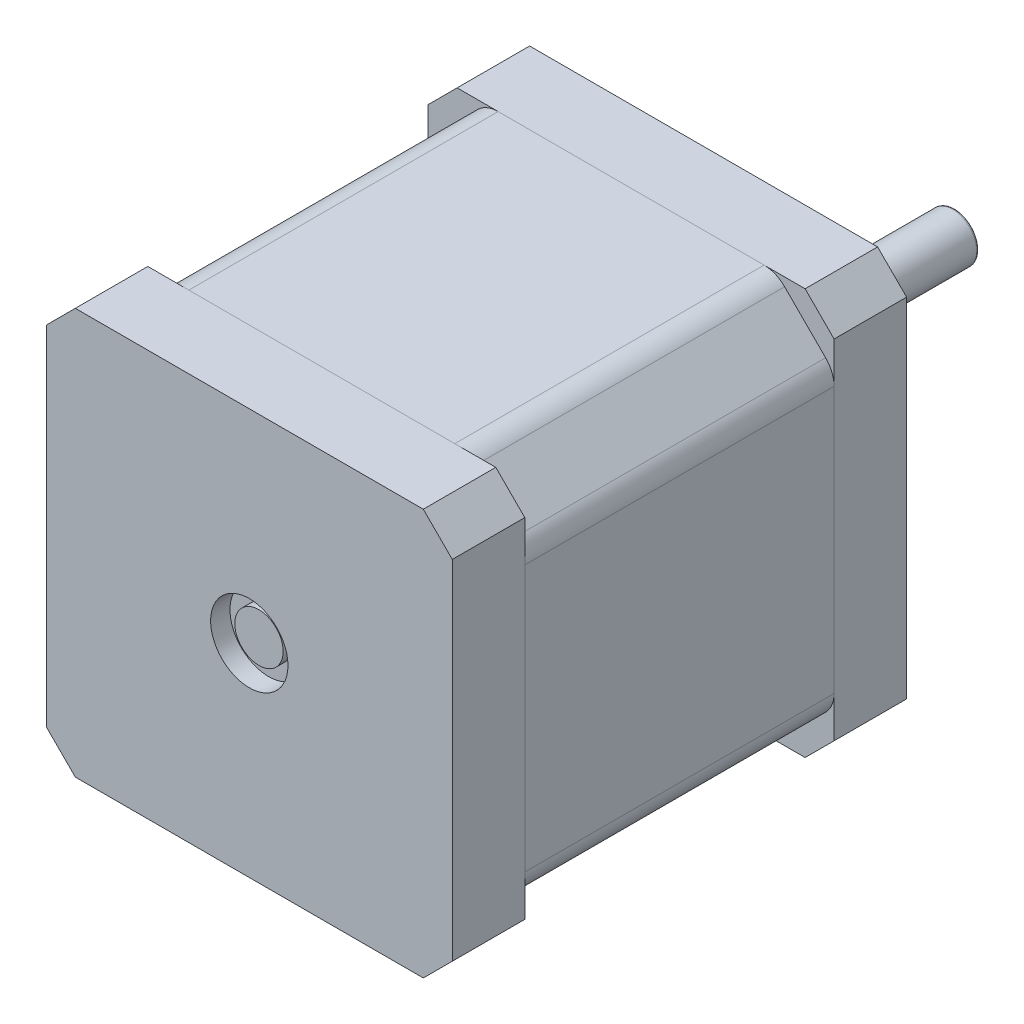
from build123d import *
from build123d.topology import SkipClean

# Parameters (mm, degrees)
IZIM1_R                     = 1.5
Y_KSEKLIK_EKSTR_ZYON1_DEPTH = 32
Y_KSEKLIK_EKSTR_ZYON2_START = 7.5
IZIM2_R                     = 1.5
Y_KSEKLIK_EKSTR_ZYON2_DEPTH = 7.5
IZIM3_R                     = 11
Y_KSEKLIK_EKSTR_ZYON3_DEPTH = 2
RADYUS1_R                   = 1
IZIM4_R                     = 4
KES_EKSTR_ZYON2_DEPTH       = 2
IZIM5_R                     = 2.5
Y_KSEKLIK_EKSTR_ZYON4_DEPTH = 26
IZIM6_W                     = 1.233072443
IZIM6_H                     = 4.616083878
KES_EKSTR_ZYON3_DEPTH       = 17
RADYUS2_R                   = 0.25
Y_KSEKLIK_EKSTR_ZYON5_DEPTH = 7.5
KES_EKSTR_ZYON4_START       = -2
IZIM8_R                     = 4
KES_EKSTR_ZYON4_DEPTH       = 2
Y_KSEKLIK_EKSTR_ZYON7_START = 1
IZIM10_R                    = 2.5
Y_KSEKLIK_EKSTR_ZYON7_DEPTH = 1
IZIM12_W                    = 1.322916666
IZIM12_H                    = 0.118723291
IZIM12_W_2                  = 1.356837607
Y_KSEKLIK_EKSTR_ZYON8_DEPTH = 0.1


with BuildPart() as part:
    # Çizim1 → Yükseklik-Ekstrüzyon1 (new body)
    with BuildSketch(Plane.XY):
        with BuildLine():
            Line((-15.878338215, 20.120978902), (-20.120978902, 15.878338215))
            ThreePointArc((-20.120978902, 15.878338215), (-20.771297156, 14.905068169), (-20.999658559, 13.757017872))
            Line((-20.999658559, 13.757017872), (-20.999658559, -13.757017872))
            ThreePointArc((-20.999658559, -13.757017872), (-20.771297156, -14.905068169), (-20.120978902, -15.878338215))
            Line((-20.120978902, -15.878338215), (-15.878338215, -20.120978902))
            ThreePointArc((-15.878338215, -20.120978902), (-14.905068169, -20.771297156), (-13.757017872, -20.999658559))
            Line((-13.757017872, -20.999658559), (13.757017872, -20.999658559))
            ThreePointArc((13.757017872, -20.999658559), (14.905068169, -20.771297156), (15.878338215, -20.120978902))
            Line((15.878338215, -20.120978902), (20.120978902, -15.878338215))
            ThreePointArc((20.120978902, -15.878338215), (20.771297156, -14.905068169), (20.999658559, -13.757017872))
            Line((20.999658559, -13.757017872), (20.999658559, 13.757017872))
            ThreePointArc((20.999658559, 13.757017872), (20.771297156, 14.905068169), (20.120978902, 15.878338215))
            Line((20.120978902, 15.878338215), (15.878338215, 20.120978902))
            ThreePointArc((15.878338215, 20.120978902), (14.905068169, 20.771297156), (13.757017872, 20.999658559))
            Line((13.757017872, 20.999658559), (-13.757017872, 20.999658559))
            ThreePointArc((-13.757017872, 20.999658559), (-14.905068169, 20.771297156), (-15.878338215, 20.120978902))
        make_face()
        with Locations((-15.5, 15.5)):
            Circle(IZIM1_R, mode=Mode.SUBTRACT)
        with Locations((15.5, 15.5)):
            Circle(IZIM1_R, mode=Mode.SUBTRACT)
        with Locations((15.5, -15.5)):
            Circle(IZIM1_R, mode=Mode.SUBTRACT)
        with Locations((-15.5, -15.5)):
            Circle(IZIM1_R, mode=Mode.SUBTRACT)
    extrude(amount=Y_KSEKLIK_EKSTR_ZYON1_DEPTH)

    # Çizim2 → Yükseklik-Ekstrüzyon2 (add)
    with SkipClean():  # the faces are left unmerged after this step: merging them gives an invalid solid
        with BuildSketch(Plane(origin=(0, 0, 0), x_dir=(-1, 0, 0), z_dir=(0, 0, -1)).offset(Y_KSEKLIK_EKSTR_ZYON2_START)):
            Polygon((-21, 18), (-18, 21), (18, 21), (21, 18), (21, -18), (18, -21), (-18, -21), (-21, -18), align=None)
            with Locations((-15.5, 15.5)):
                Circle(IZIM2_R, mode=Mode.SUBTRACT)
            with Locations((15.5, 15.5)):
                Circle(IZIM2_R, mode=Mode.SUBTRACT)
            with Locations((15.5, -15.5)):
                Circle(IZIM2_R, mode=Mode.SUBTRACT)
            with Locations((-15.5, -15.5)):
                Circle(IZIM2_R, mode=Mode.SUBTRACT)
        extrude(amount=-Y_KSEKLIK_EKSTR_ZYON2_DEPTH)

    # Çizim3 → Yükseklik-Ekstrüzyon3 (add)
    with SkipClean():  # the faces are left unmerged after this step: merging them gives an invalid solid
        with BuildSketch(Plane(origin=(0, 0, -7.5), x_dir=(-1, 0, 0), z_dir=(0, 0, -1))):
            Circle(IZIM3_R)
        extrude(amount=Y_KSEKLIK_EKSTR_ZYON3_DEPTH)

    # Radyus1
    radyus1_edges = [part.edges().sort_by_distance(p)[0] for p in [
        (11, 0, -7.5),
    ]]
    fillet(radyus1_edges, radius=RADYUS1_R)

    # Çizim4 → Kes-Ekstrüzyon2 (cut)
    with BuildSketch(Plane(origin=(0, 0, -9.5), x_dir=(-1, 0, 0), z_dir=(0, 0, -1))):
        Circle(IZIM4_R)
    extrude(amount=-KES_EKSTR_ZYON2_DEPTH, mode=Mode.SUBTRACT)

    # Çizim5 → Yükseklik-Ekstrüzyon4 (add)
    with BuildSketch(Plane(origin=(0, 0, -7.5), x_dir=(-1, 0, 0), z_dir=(0, 0, -1))):
        Circle(IZIM5_R)
    extrude(amount=Y_KSEKLIK_EKSTR_ZYON4_DEPTH)

    # Çizim6 → Kes-Ekstrüzyon3 (cut)
    with BuildSketch(Plane(origin=(0, 0, -33.5), x_dir=(-1, 0, 0), z_dir=(0, 0, -1))):
        with Locations((2.616536222, -0.191958061)):
            Rectangle(IZIM6_W, IZIM6_H)
    extrude(amount=-KES_EKSTR_ZYON3_DEPTH, mode=Mode.SUBTRACT)

    # Radyus2
    radyus2_edges = [part.edges().sort_by_distance(p)[0] for p in [
        (-2, 0, -33.5),
        (2.5, 0, -33.5),
    ]]
    fillet(radyus2_edges, radius=RADYUS2_R)

    # Çizim7 → Yükseklik-Ekstrüzyon5 (add)
    with BuildSketch(Plane.XY.offset(32)):
        Polygon((-18, 21), (18, 21), (21, 18), (21, -18), (18, -21), (-18, -21), (-21, -18), (-21, 18), align=None)
    extrude(amount=Y_KSEKLIK_EKSTR_ZYON5_DEPTH)

    # Çizim8 → Kes-Ekstrüzyon4 (cut)
    with BuildSketch(Plane.XY.offset(39.5).offset(KES_EKSTR_ZYON4_START)):
        Circle(IZIM8_R)
    extrude(amount=KES_EKSTR_ZYON4_DEPTH, mode=Mode.SUBTRACT)

    # Çizim10 → Yükseklik-Ekstrüzyon7 (add)
    with BuildSketch(Plane.XY.offset(37.5).offset(Y_KSEKLIK_EKSTR_ZYON7_START)):
        Circle(IZIM10_R)
    extrude(amount=-Y_KSEKLIK_EKSTR_ZYON7_DEPTH)

    # Çizim12 → Yükseklik-Ekstrüzyon8 (add)
    # profile 1 of 54: a face of its own
    with BuildSketch(Plane.ZY.offset(20.999658559)):
        with BuildLine():
            Line((7.410133378, -7.700053419), (7.34308652, -7.588220319))
            add(Edge.make_bspline(
                [(7.34308652, -7.588220319), (7.36049776, -7.577819081), (7.393857026, -7.557890709), (7.438933725, -7.524647189), (7.477246207, -7.490201119), (7.508571592, -7.454297412), (7.533234117, -7.417155224), (7.550697461, -7.378532084), (7.561589214, -7.33855815), (7.562912163, -7.311353759), (7.563572631, -7.297772269)],
                knots=[0, 0, 0, 0, 1.272034388, 2.437168799, 3.508375237, 4.49857839, 5.41946034, 6.295179144, 7.148887113, 8, 8, 8, 8], degree=3))
            add(Edge.make_bspline(
                [(7.563572631, -7.297772269), (7.563241899, -7.286175715), (7.562586224, -7.263185518), (7.55654057, -7.22927391), (7.546649892, -7.196503749), (7.533242008, -7.165200789), (7.516760804, -7.136194355), (7.49732637, -7.110350647), (7.474870578, -7.088528376), (7.450225308, -7.070437449), (7.423797314, -7.056438822), (7.396567019, -7.045858523), (7.368160805, -7.039932986), (7.349030489, -7.039043807), (7.339376417, -7.038595085)],
                knots=[0, 0, 0, 0, 1.09553864, 2.171907928, 3.244545276, 4.325730702, 5.384330216, 6.391480148, 7.371786628, 8.333890167, 9.27165687, 10.191402356, 11.087295184, 12, 12, 12, 12], degree=3))
            add(Edge.make_bspline(
                [(7.339376417, -7.038595085), (7.328358193, -7.039140371), (7.306045089, -7.040244634), (7.273068398, -7.049976578), (7.240293228, -7.064836848), (7.220015855, -7.078803832), (7.209522818, -7.0860314)],
                knots=[0, 0, 0, 0, 0.938992559, 1.901562324, 2.914110574, 4, 4, 4, 4], degree=3))
            add(Edge.make_bspline(
                [(7.209522818, -7.0860314), (7.201944638, -7.091953651), (7.186035197, -7.104386676), (7.16237361, -7.125779315), (7.137917249, -7.150754321), (7.112129208, -7.178969871), (7.085223682, -7.210473294), (7.056990712, -7.245276778), (7.028007242, -7.283677353), (7.008593923, -7.310630586), (6.998576971, -7.324538011)],
                knots=[0, 0, 0, 0, 0.72225051, 1.516274602, 2.393638633, 3.3469932, 4.386926276, 5.505032946, 6.712638081, 8, 8, 8, 8], degree=3))
            add(Edge.make_bspline(
                [(6.998576971, -7.324538011), (6.988663189, -7.338456605), (6.969708794, -7.365067896), (6.941578186, -7.402282896), (6.915859224, -7.435561607), (6.892309791, -7.464756116), (6.870926693, -7.489853583), (6.85191527, -7.511051777), (6.834761364, -7.527810695), (6.823633238, -7.537129918), (6.818636984, -7.541314019)],
                knots=[0, 0, 0, 0, 1.452282411, 2.77665338, 3.964542531, 5.026858415, 5.96415736, 6.766646006, 7.446254459, 8, 8, 8, 8], degree=3))
            add(Edge.make_bspline(
                [(6.818636984, -7.541314019), (6.810849896, -7.547161293), (6.795535542, -7.558660741), (6.771605762, -7.573856503), (6.747156339, -7.58667113), (6.722098665, -7.596984509), (6.696621062, -7.605324548), (6.670532254, -7.611123015), (6.644009348, -7.614697067), (6.626164386, -7.615066256), (6.617231401, -7.615251068)],
                knots=[0, 0, 0, 0, 1.068019517, 2.100403715, 3.106014851, 4.09224787, 5.069873182, 6.043214339, 7.020455327, 8, 8, 8, 8], degree=3))
            add(Edge.make_bspline(
                [(6.617231401, -7.615251068), (6.603235001, -7.614757752), (6.575541363, -7.613781665), (6.535086655, -7.605526151), (6.496461142, -7.592497405), (6.460056127, -7.574238627), (6.426786295, -7.550723512), (6.396352185, -7.523392346), (6.370417895, -7.491140826), (6.348111682, -7.455435996), (6.330471825, -7.416559596), (6.31768816, -7.3756312), (6.310094823, -7.332945015), (6.309035401, -7.303986), (6.308497844, -7.289292034)],
                knots=[0, 0, 0, 0, 1.005248779, 1.989011071, 2.95484373, 3.928844559, 4.904706341, 5.875556129, 6.859318422, 7.868909462, 8.894684146, 9.918924798, 10.944050749, 12, 12, 12, 12], degree=3))
            add(Edge.make_bspline(
                [(6.308497844, -7.289292034), (6.309028234, -7.273700222), (6.31008301, -7.242693084), (6.31948225, -7.19715613), (6.334441566, -7.153134146), (6.351992763, -7.117878326), (6.369410637, -7.090226948), (6.385310058, -7.069160409), (6.403576245, -7.047696583), (6.424594278, -7.026066143), (6.447943776, -7.004055551), (6.473822392, -6.981766193), (6.50199692, -6.95898948), (6.522115374, -6.944341511), (6.532429051, -6.936832265)],
                knots=[0, 0, 0, 0, 1.286507425, 2.558452658, 3.822738219, 5.118007103, 5.800084425, 6.519418873, 7.295692132, 8.12638276, 9.008892966, 9.945018126, 10.946518512, 12, 12, 12, 12], degree=3))
            Line((6.532429051, -6.936832265), (6.613786306, -7.04416024))
            add(Edge.make_bspline(
                [(6.613786306, -7.04416024), (6.605436824, -7.050640521), (6.589357673, -7.063120029), (6.566847561, -7.082074067), (6.546257648, -7.099911633), (6.52842074, -7.117620434), (6.512001139, -7.133835482), (6.498192787, -7.149852668), (6.486559406, -7.165053886), (6.474121772, -7.184168997), (6.462165698, -7.208383464), (6.451663692, -7.238526579), (6.445433341, -7.270133828), (6.444602308, -7.291650018), (6.444181605, -7.302542401)],
                knots=[0, 0, 0, 0, 1.181392137, 2.275085037, 3.289537922, 4.225335853, 5.084247276, 5.86831218, 6.587234301, 7.222706459, 8.415108401, 9.595592188, 10.782789524, 12, 12, 12, 12], degree=3))
            add(Edge.make_bspline(
                [(6.444181605, -7.302542401), (6.444632099, -7.316211931), (6.445500835, -7.342572331), (6.455238399, -7.379909194), (6.470043709, -7.413708372), (6.491392811, -7.442679587), (6.516845053, -7.466600671), (6.545871543, -7.484118996), (6.577930171, -7.494592895), (6.600282543, -7.495874882), (6.611666247, -7.496527778)],
                knots=[0, 0, 0, 0, 1.144248881, 2.206576175, 3.214949548, 4.222996039, 5.203671638, 6.127710127, 7.046472867, 8, 8, 8, 8], degree=3))
            add(Edge.make_bspline(
                [(6.611666247, -7.496527778), (6.618752234, -7.496370697), (6.633022919, -7.496054346), (6.654006309, -7.492011897), (6.674879059, -7.486546175), (6.69556771, -7.47816696), (6.716540742, -7.466498209), (6.738094381, -7.451191307), (6.760414279, -7.431908532), (6.774931388, -7.417138496), (6.782595985, -7.409340361)],
                knots=[0, 0, 0, 0, 0.858259122, 1.72847414, 2.583651051, 3.473048463, 4.427392529, 5.488649985, 6.674082839, 8, 8, 8, 8], degree=3))
            add(Edge.make_bspline(
                [(6.782595985, -7.409340361), (6.785180218, -7.406444545), (6.791319764, -7.399564748), (6.801371013, -7.38698724), (6.81376968, -7.370377909), (6.829110719, -7.35017047), (6.846906391, -7.32599233), (6.866929155, -7.297840831), (6.889829016, -7.266029776), (6.905839157, -7.243456313), (6.914304635, -7.231520433)],
                knots=[0, 0, 0, 0, 0.420754252, 0.999615792, 1.744751191, 2.668019286, 3.750313428, 4.999500688, 6.413464383, 8, 8, 8, 8], degree=3))
            add(Edge.make_bspline(
                [(6.914304635, -7.231520433), (6.924752418, -7.217162672), (6.944983102, -7.189360858), (6.975378215, -7.149802648), (7.005105541, -7.113935517), (7.03397331, -7.081630885), (7.061769002, -7.052578493), (7.088805477, -7.027071206), (7.114905432, -7.004993291), (7.148139652, -6.980900237), (7.189334684, -6.956573395), (7.239829118, -6.935715127), (7.290468456, -6.922445454), (7.324460196, -6.92072209), (7.341231468, -6.919871795)],
                knots=[0, 0, 0, 0, 1.163604038, 2.253157948, 3.268574773, 4.215621239, 5.091738613, 5.902582348, 6.650434646, 7.330118262, 8.591011492, 9.77460283, 10.902005569, 12, 12, 12, 12], degree=3))
            add(Edge.make_bspline(
                [(7.341231468, -6.919871795), (7.353091617, -6.920120431), (7.3765816, -6.920612874), (7.411075673, -6.926264062), (7.444569237, -6.934562864), (7.476615159, -6.946970264), (7.507727624, -6.962360899), (7.537320534, -6.981610151), (7.565968816, -7.004039174), (7.592869309, -7.029754736), (7.617594329, -7.057879064), (7.639497485, -7.087711534), (7.658181052, -7.118940723), (7.673060681, -7.151904821), (7.684776614, -7.186249706), (7.693241625, -7.222088636), (7.698442725, -7.259457914), (7.698982141, -7.28485824), (7.699256391, -7.297772269)],
                knots=[0, 0, 0, 0, 0.983922938, 1.948738757, 2.895227473, 3.844781104, 4.796118043, 5.772795661, 6.770647148, 7.813532943, 8.8582745, 9.876489951, 10.882905461, 11.874265028, 12.874055871, 13.891769171, 14.928133632, 16, 16, 16, 16], degree=3))
            add(Edge.make_bspline(
                [(7.699256391, -7.297772269), (7.699063177, -7.307764199), (7.698679181, -7.327622222), (7.695284471, -7.356994556), (7.690481488, -7.385773506), (7.682856174, -7.413597958), (7.673604442, -7.440826364), (7.662212935, -7.467340424), (7.648561248, -7.49315253), (7.632953651, -7.518409086), (7.614785313, -7.543039089), (7.593643233, -7.566838227), (7.570066528, -7.590432592), (7.543690977, -7.613654811), (7.514226541, -7.635998249), (7.482112104, -7.657999302), (7.447252166, -7.679550746), (7.422737408, -7.693091546), (7.410133378, -7.700053419)],
                knots=[0, 0, 0, 0, 0.915313873, 1.819100311, 2.706792138, 3.586475221, 4.459428225, 5.3405999, 6.2277379, 7.133009489, 8.059106158, 9.028520402, 10.047404263, 11.114294124, 12.246039232, 13.433834781, 14.680630578, 16, 16, 16, 16], degree=3))
        make_face()
    # profile 2 of 54: a face of its own
    with BuildSketch(Plane.ZY.offset(20.999658559)):
        Polygon((6.478102545, -6.801148504), (6.342418785, -6.801148504), (6.342418785, -6.105769231), (6.478102545, -6.105769231), (6.478102545, -6.394097222), (7.665335451, -6.394097222), (7.665335451, -6.512820513), (6.478102545, -6.512820513), align=None)
    # profile 3 of 54: a face of its own
    with BuildSketch(Plane.ZY.offset(20.999658559)):
        Polygon((6.342418785, -5.86832265), (6.342418785, -5.122061966), (6.478102545, -5.122061966), (6.478102545, -5.749599359), (6.885153827, -5.749599359), (6.885153827, -5.122061966), (7.020837588, -5.122061966), (7.020837588, -5.749599359), (7.529651691, -5.749599359), (7.529651691, -5.122061966), (7.665335451, -5.122061966), (7.665335451, -5.86832265), align=None)
    # profile 4 of 54: a face of its own
    with BuildSketch(Plane.ZY.offset(20.999658559)):
        with BuildLine():
            Line((6.342418785, -4.884615385), (6.342418785, -4.625173194))
            add(Edge.make_bspline(
                [(6.342418785, -4.625173194), (6.3424384, -4.607328595), (6.342475984, -4.573137552), (6.343615486, -4.52410835), (6.34513748, -4.479579076), (6.347247303, -4.439645748), (6.349740657, -4.404185496), (6.353237708, -4.373358779), (6.356889069, -4.346923292), (6.360601327, -4.331083652), (6.362294335, -4.323859842)],
                knots=[0, 0, 0, 0, 1.415646017, 2.712440637, 3.8905458, 4.950247383, 5.884950622, 6.709939814, 7.411656543, 8, 8, 8, 8], degree=3))
            add(Edge.make_bspline(
                [(6.362294335, -4.323859842), (6.364797373, -4.314715342), (6.369744466, -4.296641821), (6.379651213, -4.270597713), (6.391404792, -4.245824205), (6.40477475, -4.222210724), (6.42041922, -4.200187354), (6.437297441, -4.179019933), (6.456500154, -4.159455669), (6.477421702, -4.141229568), (6.499796733, -4.124383688), (6.524031773, -4.110230103), (6.549403275, -4.097854649), (6.576256059, -4.087722237), (6.604616194, -4.080187354), (6.634282136, -4.074593463), (6.665287244, -4.071026591), (6.686476824, -4.070686134), (6.69726362, -4.070512821)],
                knots=[0, 0, 0, 0, 0.999549623, 1.97554611, 2.93413192, 3.889860808, 4.833293765, 5.780583482, 6.742559327, 7.719844669, 8.705620613, 9.691528643, 10.674968152, 11.680406189, 12.713313868, 13.765869198, 14.862690416, 16, 16, 16, 16], degree=3))
            add(Edge.make_bspline(
                [(6.69726362, -4.070512821), (6.708140934, -4.070672109), (6.729423134, -4.070983768), (6.760558087, -4.074724328), (6.790311764, -4.079762823), (6.818618194, -4.087510221), (6.845309273, -4.097657246), (6.870792894, -4.109560492), (6.894635508, -4.123917362), (6.916923674, -4.140414069), (6.937678314, -4.158765415), (6.956749025, -4.178893758), (6.974024177, -4.200717836), (6.989542497, -4.224168291), (7.002944126, -4.24947374), (7.014947632, -4.276250387), (7.025028657, -4.304730975), (7.030331687, -4.324439603), (7.033027926, -4.334460136)],
                knots=[0, 0, 0, 0, 1.121902311, 2.195077645, 3.232258892, 4.234102512, 5.217864754, 6.176164875, 7.132989551, 8.084763148, 9.034132444, 9.988522005, 10.94243251, 11.903244335, 12.886203696, 13.894208494, 14.929344452, 16, 16, 16, 16], degree=3))
            add(Edge.make_bspline(
                [(7.033027926, -4.334460136), (7.034789108, -4.342748241), (7.038648842, -4.360912104), (7.042987074, -4.390824293), (7.046544898, -4.425668641), (7.049865088, -4.465326593), (7.051624374, -4.509890629), (7.053690063, -4.559258542), (7.054664748, -4.613597409), (7.05472636, -4.651497075), (7.054758528, -4.671284472)],
                knots=[0, 0, 0, 0, 0.601372724, 1.317943291, 2.144091499, 3.08771165, 4.142394186, 5.309582461, 6.595334295, 8, 8, 8, 8], degree=3))
            Line((7.054758528, -4.671284472), (7.054758528, -4.765892094))
            Line((7.054758528, -4.765892094), (7.665335451, -4.765892094))
            Line((7.665335451, -4.765892094), (7.665335451, -4.884615385))
            Line((7.665335451, -4.884615385), (6.342418785, -4.884615385))
        make_face()
        with BuildLine():
            Line((6.478102545, -4.765892094), (6.919074767, -4.765892094))
            Line((6.919074767, -4.765892094), (6.921989848, -4.534275674))
            add(Edge.make_bspline(
                [(6.921989848, -4.534275674), (6.921996076, -4.522966576), (6.922008097, -4.501134594), (6.920496662, -4.469598746), (6.918775131, -4.440336289), (6.916171416, -4.413457262), (6.912758357, -4.388867353), (6.908513877, -4.366778957), (6.903899452, -4.346861707), (6.896189893, -4.323950769), (6.884335655, -4.29819812), (6.867079167, -4.270065317), (6.844724212, -4.246407722), (6.819659579, -4.225973134), (6.791851302, -4.209437792), (6.761941601, -4.197772768), (6.730373585, -4.190589928), (6.708785412, -4.18969286), (6.697793634, -4.189236111)],
                knots=[0, 0, 0, 0, 1.160746174, 2.240796558, 3.240300023, 4.169675897, 5.012224395, 5.787635701, 6.478238024, 7.109103438, 8.265591281, 9.382545711, 10.479929969, 11.588830844, 12.694575677, 13.785760505, 14.872603606, 16, 16, 16, 16], degree=3))
            add(Edge.make_bspline(
                [(6.697793634, -4.189236111), (6.687157957, -4.189713366), (6.666015546, -4.19066209), (6.635029373, -4.197713492), (6.605458724, -4.209563053), (6.577874391, -4.22598759), (6.552864911, -4.245926262), (6.531102271, -4.269082266), (6.513724279, -4.295514843), (6.502075761, -4.31989827), (6.495255964, -4.341733328), (6.490330274, -4.360605607), (6.486933671, -4.382023437), (6.483683545, -4.405783316), (6.481060045, -4.431855077), (6.479238187, -4.460404425), (6.478183137, -4.49133629), (6.47813006, -4.512809232), (6.478102545, -4.523940388)],
                knots=[0, 0, 0, 0, 1.120540835, 2.227496496, 3.330685923, 4.466139262, 5.598993257, 6.692710361, 7.80064471, 8.921224235, 9.527843361, 10.209888745, 10.975318552, 11.811557897, 12.738105936, 13.73658638, 14.826690375, 16, 16, 16, 16], degree=3))
            Line((6.478102545, -4.523940388), (6.478102545, -4.765892094))
        make_face(mode=Mode.SUBTRACT)
    # profile 5 of 54: a face of its own
    with BuildSketch(Plane.ZY.offset(20.999658559)):
        with BuildLine():
            Line((6.342418785, -3.799145299), (6.342418785, -3.539703108))
            add(Edge.make_bspline(
                [(6.342418785, -3.539703108), (6.3424384, -3.52185851), (6.342475984, -3.487667467), (6.343615486, -3.438638264), (6.34513748, -3.394108991), (6.347247303, -3.354175662), (6.349740657, -3.318715411), (6.353237708, -3.287888693), (6.356889069, -3.261453206), (6.360601327, -3.245613566), (6.362294335, -3.238389757)],
                knots=[0, 0, 0, 0, 1.415646017, 2.712440637, 3.8905458, 4.950247383, 5.884950622, 6.709939814, 7.411656543, 8, 8, 8, 8], degree=3))
            add(Edge.make_bspline(
                [(6.362294335, -3.238389757), (6.364797373, -3.229245257), (6.369744466, -3.211171736), (6.379651213, -3.185127628), (6.391404792, -3.160354119), (6.40477475, -3.136740639), (6.42041922, -3.114717269), (6.437297441, -3.093549847), (6.456500154, -3.073985584), (6.477421702, -3.055759482), (6.499796733, -3.038913603), (6.524031773, -3.024760017), (6.549403275, -3.012384564), (6.576256059, -3.002252151), (6.604616194, -2.994717269), (6.634282136, -2.989123377), (6.665287244, -2.985556506), (6.686476824, -2.985216049), (6.69726362, -2.985042735)],
                knots=[0, 0, 0, 0, 0.999549623, 1.97554611, 2.93413192, 3.889860808, 4.833293765, 5.780583482, 6.742559327, 7.719844669, 8.705620613, 9.691528643, 10.674968152, 11.680406189, 12.713313868, 13.765869198, 14.862690416, 16, 16, 16, 16], degree=3))
            add(Edge.make_bspline(
                [(6.69726362, -2.985042735), (6.708140934, -2.985202024), (6.729423134, -2.985513682), (6.760558087, -2.989254243), (6.790311764, -2.994292738), (6.818618194, -3.002040135), (6.845309273, -3.012187161), (6.870792894, -3.024090407), (6.894635508, -3.038447277), (6.916923674, -3.054943983), (6.937678314, -3.07329533), (6.956749025, -3.093423673), (6.974024177, -3.115247751), (6.989542497, -3.138698205), (7.002944126, -3.164003654), (7.014947632, -3.190780301), (7.025028657, -3.219260889), (7.030331687, -3.238969518), (7.033027926, -3.248990051)],
                knots=[0, 0, 0, 0, 1.121902311, 2.195077645, 3.232258892, 4.234102512, 5.217864754, 6.176164875, 7.132989551, 8.084763148, 9.034132444, 9.988522005, 10.94243251, 11.903244335, 12.886203696, 13.894208494, 14.929344452, 16, 16, 16, 16], degree=3))
            add(Edge.make_bspline(
                [(7.033027926, -3.248990051), (7.034789108, -3.257278155), (7.038648842, -3.275442018), (7.042987074, -3.305354207), (7.046544898, -3.340198556), (7.049865088, -3.379856507), (7.051624374, -3.424420544), (7.053690063, -3.473788457), (7.054664748, -3.528127324), (7.05472636, -3.566026989), (7.054758528, -3.585814386)],
                knots=[0, 0, 0, 0, 0.601372724, 1.317943291, 2.144091499, 3.08771165, 4.142394186, 5.309582461, 6.595334295, 8, 8, 8, 8], degree=3))
            Line((7.054758528, -3.585814386), (7.054758528, -3.680422009))
            Line((7.054758528, -3.680422009), (7.665335451, -3.680422009))
            Line((7.665335451, -3.680422009), (7.665335451, -3.799145299))
            Line((7.665335451, -3.799145299), (6.342418785, -3.799145299))
        make_face()
        with BuildLine():
            Line((6.478102545, -3.680422009), (6.919074767, -3.680422009))
            Line((6.919074767, -3.680422009), (6.921989848, -3.448805589))
            add(Edge.make_bspline(
                [(6.921989848, -3.448805589), (6.921996076, -3.43749649), (6.922008097, -3.415664508), (6.920496662, -3.38412866), (6.918775131, -3.354866203), (6.916171416, -3.327987177), (6.912758357, -3.303397267), (6.908513877, -3.281308871), (6.903899452, -3.261391621), (6.896189893, -3.238480683), (6.884335655, -3.212728034), (6.867079167, -3.184595231), (6.844724212, -3.160937636), (6.819659579, -3.140503048), (6.791851302, -3.123967707), (6.761941601, -3.112302683), (6.730373585, -3.105119842), (6.708785412, -3.104222774), (6.697793634, -3.103766026)],
                knots=[0, 0, 0, 0, 1.160746174, 2.240796558, 3.240300023, 4.169675897, 5.012224395, 5.787635701, 6.478238024, 7.109103438, 8.265591281, 9.382545711, 10.479929969, 11.588830844, 12.694575677, 13.785760505, 14.872603606, 16, 16, 16, 16], degree=3))
            add(Edge.make_bspline(
                [(6.697793634, -3.103766026), (6.687157957, -3.104243281), (6.666015546, -3.105192005), (6.635029373, -3.112243407), (6.605458724, -3.124092967), (6.577874391, -3.140517504), (6.552864911, -3.160456176), (6.531102271, -3.183612181), (6.513724279, -3.210044757), (6.502075761, -3.234428184), (6.495255964, -3.256263243), (6.490330274, -3.275135522), (6.486933671, -3.296553352), (6.483683545, -3.320313231), (6.481060045, -3.346384991), (6.479238187, -3.37493434), (6.478183137, -3.405866204), (6.47813006, -3.427339147), (6.478102545, -3.438470302)],
                knots=[0, 0, 0, 0, 1.120540835, 2.227496496, 3.330685923, 4.466139262, 5.598993257, 6.692710361, 7.80064471, 8.921224235, 9.527843361, 10.209888745, 10.975318552, 11.811557897, 12.738105936, 13.73658638, 14.826690375, 16, 16, 16, 16], degree=3))
            Line((6.478102545, -3.438470302), (6.478102545, -3.680422009))
        make_face(mode=Mode.SUBTRACT)
    # profile 6 of 54: a face of its own
    with BuildSketch(Plane.ZY.offset(20.999658559)):
        with Locations((7.003877118, -2.654313569)):
            Rectangle(IZIM12_W, IZIM12_H)
    # profile 7 of 54: a face of its own
    with BuildSketch(Plane.ZY.offset(20.999658559)):
        Polygon((7.665335451, -2.306623932), (6.342418785, -2.306623932), (6.342418785, -2.281713241), (7.383632643, -1.407719017), (6.342418785, -1.407719017), (6.342418785, -1.288995726), (7.665335451, -1.288995726), (7.665335451, -1.316026476), (6.626506658, -2.187900641), (7.665335451, -2.187900641), align=None)
    # profile 8 of 54: a face of its own
    with BuildSketch(Plane.ZY.offset(20.999658559)):
        with BuildLine():
            Line((6.568205043, 0.288327991), (6.664667716, 0.186565171))
            add(Edge.make_bspline(
                [(6.664667716, 0.186565171), (6.647338936, 0.168154298), (6.61309459, 0.131771571), (6.568734268, 0.072353735), (6.530357239, 0.010609112), (6.499364858, -0.053562135), (6.475052802, -0.118477278), (6.457380161, -0.183020097), (6.446188225, -0.246772698), (6.444843984, -0.289168134), (6.444181605, -0.310058594)],
                knots=[0, 0, 0, 0, 1.089067066, 2.152164705, 3.18986567, 4.218445106, 5.218487318, 6.173592265, 7.100032889, 8, 8, 8, 8], degree=3))
            add(Edge.make_bspline(
                [(6.444181605, -0.310058594), (6.444337938, -0.322877543), (6.444650199, -0.348482194), (6.448635661, -0.386514894), (6.454367619, -0.424148712), (6.462661126, -0.461312606), (6.473172288, -0.498078837), (6.486320367, -0.53431953), (6.501649279, -0.570102298), (6.519362195, -0.605090049), (6.538820287, -0.63900991), (6.560383512, -0.671045658), (6.583359371, -0.701403369), (6.608328204, -0.729505599), (6.635045188, -0.755539281), (6.663029172, -0.779983266), (6.692830354, -0.802381976), (6.724326184, -0.822333691), (6.756783927, -0.840350906), (6.789928308, -0.855920577), (6.823451641, -0.869455887), (6.85760635, -0.879764795), (6.892040314, -0.888496376), (6.926933984, -0.8945747), (6.962378481, -0.898012891), (6.986114516, -0.898606499), (6.998046956, -0.898904915)],
                knots=[0, 0, 0, 0, 1.028150113, 2.053633673, 3.06513288, 4.081487945, 5.106702018, 6.131327874, 7.172780699, 8.228344599, 9.276313556, 10.308389736, 11.324843658, 12.329040066, 13.321460474, 14.316307835, 15.308626991, 16.309440696, 17.305625405, 18.28535951, 19.246194545, 20.203493668, 21.145557131, 22.095268976, 23.042464743, 24, 24, 24, 24], degree=3))
            add(Edge.make_bspline(
                [(6.998046956, -0.898904915), (7.010244498, -0.898619091), (7.034606274, -0.898048224), (7.070966223, -0.894399545), (7.106781955, -0.887612903), (7.142109803, -0.878612629), (7.177020076, -0.867170278), (7.211476341, -0.853112393), (7.24547525, -0.83636573), (7.278679293, -0.817024209), (7.310996307, -0.795664975), (7.341692691, -0.772173308), (7.370411215, -0.746509656), (7.397571353, -0.719144579), (7.423001696, -0.689828747), (7.44639572, -0.65827774), (7.46811517, -0.624933212), (7.487921438, -0.589780372), (7.505613508, -0.553190773), (7.521346469, -0.515674205), (7.53430321, -0.477110087), (7.544863157, -0.437701282), (7.553518922, -0.397494715), (7.559087449, -0.356286314), (7.563128328, -0.31437907), (7.563423781, -0.286129647), (7.563572631, -0.271897536)],
                knots=[0, 0, 0, 0, 0.935915162, 1.869274651, 2.799799983, 3.730201895, 4.664668062, 5.616159355, 6.583070886, 7.570012957, 8.562524459, 9.553461134, 10.53281078, 11.515274572, 12.509912756, 13.507571325, 14.526460018, 15.561318395, 16.601025881, 17.643204557, 18.680545676, 19.719612342, 20.772381578, 21.833430283, 22.908478249, 24, 24, 24, 24], degree=3))
            add(Edge.make_bspline(
                [(7.563572631, -0.271897536), (7.56321424, -0.254745531), (7.562510482, -0.221064784), (7.557027608, -0.171556018), (7.548475341, -0.124001844), (7.535911771, -0.078557072), (7.520009387, -0.035056777), (7.500343823, 0.006338604), (7.477121992, 0.045743375), (7.450814133, 0.08298698), (7.421502659, 0.117184006), (7.390155315, 0.148307351), (7.35636597, 0.17528677), (7.320638205, 0.198928167), (7.282630278, 0.218468494), (7.242553627, 0.234512026), (7.200383457, 0.24680852), (7.171244698, 0.251856425), (7.156521349, 0.254407051)],
                knots=[0, 0, 0, 0, 1.130199668, 2.219330667, 3.279027493, 4.311506524, 5.322739849, 6.327972234, 7.327472899, 8.33386792, 9.329086447, 10.29244429, 11.240784345, 12.174119183, 13.111530729, 14.052100829, 15.015757696, 16, 16, 16, 16], degree=3))
            Line((7.156521349, 0.254407051), (7.156521349, -0.186565171))
            Line((7.156521349, -0.186565171), (7.020837588, -0.186565171))
            Line((7.020837588, -0.186565171), (7.020837588, 0.373130342))
            add(Edge.make_bspline(
                [(7.020837588, 0.373130342), (7.046127026, 0.372485572), (7.095623024, 0.37122364), (7.167805239, 0.362371848), (7.235981445, 0.348078107), (7.300223439, 0.328551739), (7.360440184, 0.303274475), (7.416692818, 0.272517597), (7.468617932, 0.235788849), (7.516639431, 0.194396509), (7.559475175, 0.147943251), (7.597123848, 0.097684279), (7.628837038, 0.043536556), (7.654637944, -0.014448699), (7.674774245, -0.07608166), (7.689051002, -0.141504947), (7.697604589, -0.210629838), (7.698697462, -0.258004117), (7.699256391, -0.282232823)],
                knots=[0, 0, 0, 0, 1.140356446, 2.231883559, 3.274166699, 4.278491846, 5.25512956, 6.21435461, 7.1637429, 8.11826594, 9.068280886, 10.0076534, 10.945064095, 11.891975133, 12.864533718, 13.863980011, 14.907571808, 16, 16, 16, 16], degree=3))
            add(Edge.make_bspline(
                [(7.699256391, -0.282232823), (7.699041277, -0.297166713), (7.698617002, -0.326621158), (7.695601755, -0.370122789), (7.69095999, -0.412424984), (7.683950374, -0.453521583), (7.675364776, -0.493563754), (7.664370689, -0.532351514), (7.651644722, -0.570032619), (7.637169869, -0.60666531), (7.62039844, -0.641917088), (7.60176057, -0.675944968), (7.581352365, -0.708937045), (7.558820885, -0.740668587), (7.534334657, -0.771304926), (7.507844605, -0.800648519), (7.479431711, -0.828863639), (7.459255716, -0.846537981), (7.449089458, -0.85544371)],
                knots=[0, 0, 0, 0, 1.107784379, 2.184907829, 3.233506516, 4.263428166, 5.276301166, 6.270063455, 7.25232949, 8.225834625, 9.190232166, 10.146266622, 11.1027726, 12.066435141, 13.031522626, 14.010570082, 14.99756817, 16, 16, 16, 16], degree=3))
            add(Edge.make_bspline(
                [(7.449089458, -0.85544371), (7.432960967, -0.868365178), (7.400971701, -0.893993632), (7.349718151, -0.926982697), (7.296649591, -0.955104656), (7.241618288, -0.977922255), (7.184675716, -0.99573933), (7.125894639, -1.008517288), (7.065199362, -1.016003972), (7.024126479, -1.017082541), (7.003347103, -1.017628205)],
                knots=[0, 0, 0, 0, 1.023165419, 2.029347347, 3.013907458, 3.994755782, 4.975994455, 5.96558838, 6.970761222, 8, 8, 8, 8], degree=3))
            add(Edge.make_bspline(
                [(7.003347103, -1.017628205), (6.98778724, -1.017427032), (6.956865269, -1.017027242), (6.9109573, -1.012179502), (6.865864476, -1.005224206), (6.821623673, -0.995001055), (6.778205295, -0.982113509), (6.735589357, -0.966029193), (6.693750056, -0.947302825), (6.652977845, -0.925535283), (6.613804539, -0.901318825), (6.576421836, -0.875008789), (6.541435597, -0.846402158), (6.508764775, -0.815415634), (6.477925148, -0.782673851), (6.449560908, -0.747489445), (6.4232282, -0.710395491), (6.399433008, -0.671104435), (6.378051706, -0.630236277), (6.359308592, -0.587879855), (6.343817759, -0.54405056), (6.33067413, -0.499076097), (6.320954411, -0.452616216), (6.313905631, -0.40500802), (6.309082428, -0.356003365), (6.308694527, -0.322879033), (6.308497844, -0.306083484)],
                knots=[0, 0, 0, 0, 1.00895651, 2.005089799, 2.991467152, 3.967318338, 4.948153826, 5.927364234, 6.919980553, 7.91976625, 8.923240147, 9.905815003, 10.88314567, 11.851989312, 12.825009789, 13.798721852, 14.781296708, 15.773896486, 16.776076962, 17.771600213, 18.775744723, 19.78957137, 20.808953803, 21.851964491, 22.910847925, 24, 24, 24, 24], degree=3))
            add(Edge.make_bspline(
                [(6.308497844, -0.306083484), (6.308716878, -0.29238629), (6.309151197, -0.265226366), (6.312161645, -0.224810985), (6.316933171, -0.185020292), (6.323444486, -0.145795287), (6.332313203, -0.107269547), (6.342926126, -0.069333322), (6.355282856, -0.03193162), (6.370019712, 0.004818343), (6.386746528, 0.041163671), (6.405574816, 0.07730645), (6.426826529, 0.113123188), (6.45056477, 0.148676), (6.476381836, 0.184189077), (6.505016112, 0.219100713), (6.535338403, 0.254253611), (6.557140895, 0.276857273), (6.568205043, 0.288327991)],
                knots=[0, 0, 0, 0, 0.985871117, 1.954866573, 2.915460327, 3.869826059, 4.81536089, 5.759505086, 6.70452669, 7.649098992, 8.607881297, 9.583363685, 10.581137262, 11.603961102, 12.659522466, 13.73993555, 14.853081303, 16, 16, 16, 16], degree=3))
        make_face()
    # profile 9 of 54: a face of its own
    with BuildSketch(Plane.ZY.offset(20.999658559)):
        Polygon((7.665335451, 1.085470085), (6.342418785, 1.260109926), (6.342418785, 1.277070396), (7.42788887, 1.823250534), (6.342418785, 2.368105636), (6.342418785, 2.385331113), (7.665335451, 2.561030983), (7.665335451, 2.441777678), (6.713429068, 2.315104167), (7.665335451, 1.837560931), (7.665335451, 1.810795189), (6.711309009, 1.331396902), (7.665335451, 1.204988398), align=None)
    # profile 10 of 54: a face of its own
    with BuildSketch(Plane.ZY.offset(20.999658559)):
        with BuildLine():
            add(Edge.make_bspline(
                [(6.308497844, 3.451455662), (6.30910784, 3.475954254), (6.310305921, 3.52407151), (6.319779813, 3.594723395), (6.335372849, 3.662375742), (6.357393545, 3.727067445), (6.385940611, 3.788552465), (6.42061712, 3.847004452), (6.461633808, 3.902248231), (6.508388386, 3.953903536), (6.559592278, 4.001025142), (6.614407016, 4.042374596), (6.672143434, 4.077256762), (6.732804543, 4.105811614), (6.796248716, 4.128229066), (6.862831525, 4.143694402), (6.932116873, 4.153574298), (6.979374081, 4.154729268), (7.003347103, 4.155315171)],
                knots=[0, 0, 0, 0, 1.065064174, 2.09187391, 3.093564831, 4.079973196, 5.057907931, 6.036227367, 7.030399151, 8.044883615, 9.061699972, 10.052012555, 11.025713132, 11.989727027, 12.962874294, 13.945865945, 14.957962116, 16, 16, 16, 16], degree=3))
            add(Edge.make_bspline(
                [(7.003347103, 4.155315171), (7.027143396, 4.154729071), (7.074048645, 4.1535738), (7.142896298, 4.143686386), (7.20906992, 4.128160059), (7.272422016, 4.106089173), (7.33295992, 4.077512409), (7.390740046, 4.042578891), (7.445701194, 4.001307914), (7.49725784, 3.95438641), (7.544420234, 3.903084974), (7.586019302, 3.848480904), (7.620916653, 3.790746026), (7.649790295, 3.730478643), (7.67174057, 3.667205516), (7.687721095, 3.601387085), (7.697502911, 3.53266475), (7.698665484, 3.48585049), (7.699256391, 3.462055956)],
                knots=[0, 0, 0, 0, 1.043748596, 2.057349401, 3.045489418, 4.02252776, 4.995289225, 5.97782527, 6.980224157, 8.006516136, 9.032559198, 10.034193337, 11.013412982, 11.987833483, 12.961212594, 13.946489799, 14.956251404, 16, 16, 16, 16], degree=3))
            add(Edge.make_bspline(
                [(7.699256391, 3.462055956), (7.69867076, 3.438083074), (7.697516325, 3.390826141), (7.687620377, 3.321453511), (7.672145539, 3.254824721), (7.650030365, 3.191130309), (7.621448852, 3.130334755), (7.586597793, 3.072319158), (7.545244498, 3.017316385), (7.498312489, 2.965782452), (7.447220861, 2.918630225), (7.392476961, 2.87752177), (7.335154809, 2.842662873), (7.275095328, 2.814177328), (7.21258886, 2.791625583), (7.147218454, 2.776240131), (7.079356795, 2.766285768), (7.03315189, 2.765138668), (7.009707279, 2.764556624)],
                knots=[0, 0, 0, 0, 1.053102029, 2.075944431, 3.073151272, 4.055350789, 5.033113405, 6.020478099, 7.024410459, 8.052272461, 9.079885166, 10.07527673, 11.055994387, 12.023226415, 12.992069828, 13.970394897, 14.97016774, 16, 16, 16, 16], degree=3))
            add(Edge.make_bspline(
                [(7.009707279, 2.764556624), (6.993971122, 2.764758703), (6.962697325, 2.765160313), (6.916256676, 2.769995268), (6.870562885, 2.777011149), (6.82574589, 2.787066039), (6.781915399, 2.800216461), (6.738769128, 2.81573315), (6.696744328, 2.834684817), (6.655641915, 2.856108753), (6.616102617, 2.88002021), (6.578728489, 2.90643158), (6.54320591, 2.934415186), (6.510455406, 2.965093016), (6.479524232, 2.997453994), (6.450887729, 3.032023084), (6.424287673, 3.068589349), (6.400316294, 3.107310129), (6.378635907, 3.147231322), (6.360031219, 3.188384152), (6.344063214, 3.230209701), (6.331120997, 3.272903869), (6.320903531, 3.31635328), (6.31394599, 3.360652764), (6.309098703, 3.405767029), (6.308698992, 3.436160593), (6.308497844, 3.451455662)],
                knots=[0, 0, 0, 0, 1.037015668, 2.060948919, 3.074880161, 4.083647147, 5.086022904, 6.090072063, 7.104153813, 8.122640571, 9.144368836, 10.147691507, 11.138137339, 12.123020368, 13.103399296, 14.087645067, 15.080126199, 16.082011238, 17.087798457, 18.072939717, 19.057185487, 20.037253025, 21.01195951, 21.997135196, 22.992090687, 24, 24, 24, 24], degree=3))
        make_face()
        with BuildLine():
            add(Edge.make_bspline(
                [(6.444181605, 3.457285824), (6.44433411, 3.444731323), (6.444637663, 3.419742342), (6.448658042, 3.382595501), (6.454347066, 3.345925922), (6.462609524, 3.309804565), (6.473296654, 3.274155677), (6.486186177, 3.238963431), (6.501765098, 3.20434849), (6.519285486, 3.170354097), (6.539185845, 3.137765413), (6.560318082, 3.106503953), (6.583467375, 3.077382855), (6.608133084, 3.050002077), (6.634529271, 3.024429711), (6.662482588, 3.000677038), (6.692113941, 2.978763536), (6.723301385, 2.958952924), (6.755870792, 2.941323025), (6.789199577, 2.925538238), (6.823679421, 2.912453251), (6.859095161, 2.902087993), (6.895290726, 2.893290263), (6.932463325, 2.887771676), (6.970484808, 2.883711683), (6.996180476, 2.883424946), (7.009177265, 2.883279915)],
                knots=[0, 0, 0, 0, 1.008406545, 2.007172654, 2.999155034, 3.989332444, 4.982025741, 5.988181096, 6.998684226, 8.030553839, 9.059268815, 10.065399129, 11.060956322, 12.046057109, 13.024974577, 14.012068307, 14.991706172, 15.984221787, 16.978487447, 17.966117052, 18.945677757, 19.938371053, 20.93015022, 21.936155317, 22.956113857, 24, 24, 24, 24], degree=3))
            add(Edge.make_bspline(
                [(7.009177265, 2.883279915), (7.028288146, 2.883762884), (7.065885161, 2.884713036), (7.120988248, 2.892996745), (7.173996205, 2.905858021), (7.224593084, 2.924504442), (7.273004511, 2.948291631), (7.319042084, 2.977307173), (7.362692225, 3.011816788), (7.403630001, 3.050993625), (7.440980655, 3.093832463), (7.473812077, 3.139299201), (7.501443917, 3.187034125), (7.524543514, 3.236762102), (7.54194579, 3.2889077), (7.554353604, 3.343136583), (7.562395462, 3.399449949), (7.563176517, 3.437824245), (7.563572631, 3.457285824)],
                knots=[0, 0, 0, 0, 1.032022337, 2.030307203, 3.003823408, 3.974715386, 4.937372378, 5.913284036, 6.909147208, 7.938749767, 8.970518239, 9.975863271, 10.963918693, 11.946286286, 12.933361397, 13.927862637, 14.949112547, 16, 16, 16, 16], degree=3))
            add(Edge.make_bspline(
                [(7.563572631, 3.457285824), (7.563393046, 3.470367443), (7.563036877, 3.496312223), (7.559444478, 3.534901145), (7.553695169, 3.572798437), (7.545376459, 3.609934078), (7.535102936, 3.646356723), (7.522359689, 3.681956472), (7.50708359, 3.716721502), (7.490058883, 3.750822759), (7.470719276, 3.783496684), (7.44987192, 3.814568518), (7.427131088, 3.843639445), (7.40279665, 3.871007377), (7.376481604, 3.896400523), (7.34869817, 3.920085568), (7.319003928, 3.94162018), (7.287944221, 3.961363634), (7.255612264, 3.979208644), (7.222191851, 3.994536852), (7.187862228, 4.007627458), (7.15259817, 4.01817997), (7.116479002, 4.02645318), (7.07945303, 4.032152752), (7.041595224, 4.036139886), (7.015989654, 4.036440396), (7.003082096, 4.03659188)],
                knots=[0, 0, 0, 0, 1.047334373, 2.07717862, 3.100662057, 4.115010574, 5.122652213, 6.129548646, 7.140165612, 8.16200981, 9.179904151, 10.178566626, 11.156366481, 12.133321541, 13.108841334, 14.082538371, 15.054589433, 16.043660176, 17.028268541, 18.009491307, 18.985652105, 19.968123554, 20.954864208, 21.950389976, 22.966808393, 24, 24, 24, 24], degree=3))
            add(Edge.make_bspline(
                [(7.003082096, 4.03659188), (6.990262843, 4.036440269), (6.964833493, 4.036139521), (6.927239672, 4.032154716), (6.890480273, 4.026446939), (6.85469961, 4.018221154), (6.819888559, 4.007618864), (6.786079821, 3.994545675), (6.753147429, 3.979129808), (6.721172829, 3.961437393), (6.6904906, 3.941549941), (6.661159148, 3.919818205), (6.633726842, 3.89586866), (6.607525728, 3.870379309), (6.583079882, 3.842737331), (6.56048376, 3.812937904), (6.538719254, 3.781722994), (6.519457425, 3.748386699), (6.501580098, 3.714105858), (6.486327994, 3.678897511), (6.473228597, 3.643264485), (6.462577621, 3.607064313), (6.454378715, 3.570314105), (6.448652951, 3.533035234), (6.444639043, 3.495357823), (6.444334568, 3.470016762), (6.444181605, 3.457285824)],
                knots=[0, 0, 0, 0, 1.029877221, 2.042951179, 3.035109885, 4.018542222, 4.991021277, 5.957494829, 6.929429462, 7.911425532, 8.892163142, 9.866273635, 10.842761649, 11.81676864, 12.802607151, 13.805177466, 14.821356543, 15.858816981, 16.897175917, 17.927346774, 18.940346092, 19.946830556, 20.957962087, 21.964146003, 22.97721996, 24, 24, 24, 24], degree=3))
        make_face(mode=Mode.SUBTRACT)
    # profile 11 of 54: a face of its own
    with BuildSketch(Plane.ZY.offset(20.999658559)):
        Polygon((6.478102545, 4.274038462), (6.342418785, 4.274038462), (6.342418785, 4.969417735), (6.478102545, 4.969417735), (6.478102545, 4.681089744), (7.665335451, 4.681089744), (7.665335451, 4.562366453), (6.478102545, 4.562366453), align=None)
    # profile 12 of 54: a face of its own
    with BuildSketch(Plane.ZY.offset(20.999658559)):
        with BuildLine():
            add(Edge.make_bspline(
                [(6.308497844, 5.825921474), (6.30910784, 5.850420066), (6.310305921, 5.898537322), (6.319779813, 5.969189207), (6.335372849, 6.036841554), (6.357393545, 6.101533257), (6.385940611, 6.163018277), (6.42061712, 6.221470264), (6.461633808, 6.276714043), (6.508388386, 6.328369348), (6.559592278, 6.375490954), (6.614407016, 6.416840408), (6.672143434, 6.451722574), (6.732804543, 6.480277426), (6.796248716, 6.502694878), (6.862831525, 6.518160214), (6.932116873, 6.52804011), (6.979374081, 6.52919508), (7.003347103, 6.529780983)],
                knots=[0, 0, 0, 0, 1.065064174, 2.09187391, 3.093564831, 4.079973196, 5.057907931, 6.036227367, 7.030399151, 8.044883615, 9.061699972, 10.052012555, 11.025713132, 11.989727027, 12.962874294, 13.945865945, 14.957962116, 16, 16, 16, 16], degree=3))
            add(Edge.make_bspline(
                [(7.003347103, 6.529780983), (7.027143396, 6.529194883), (7.074048645, 6.528039612), (7.142896298, 6.518152198), (7.20906992, 6.502625871), (7.272422016, 6.480554985), (7.33295992, 6.451978221), (7.390740046, 6.417044703), (7.445701194, 6.375773726), (7.49725784, 6.328852222), (7.544420234, 6.277550786), (7.586019302, 6.222946716), (7.620916653, 6.165211838), (7.649790295, 6.104944455), (7.67174057, 6.041671328), (7.687721095, 5.975852897), (7.697502911, 5.907130562), (7.698665484, 5.860316302), (7.699256391, 5.836521768)],
                knots=[0, 0, 0, 0, 1.043748596, 2.057349401, 3.045489418, 4.02252776, 4.995289225, 5.97782527, 6.980224157, 8.006516136, 9.032559198, 10.034193337, 11.013412982, 11.987833483, 12.961212594, 13.946489799, 14.956251404, 16, 16, 16, 16], degree=3))
            add(Edge.make_bspline(
                [(7.699256391, 5.836521768), (7.69867076, 5.812548886), (7.697516325, 5.765291953), (7.687620377, 5.695919323), (7.672145539, 5.629290533), (7.650030365, 5.565596121), (7.621448852, 5.504800567), (7.586597793, 5.44678497), (7.545244498, 5.391782197), (7.498312489, 5.340248264), (7.447220861, 5.293096037), (7.392476961, 5.251987582), (7.335154809, 5.217128685), (7.275095328, 5.18864314), (7.21258886, 5.166091395), (7.147218454, 5.150705943), (7.079356795, 5.14075158), (7.03315189, 5.13960448), (7.009707279, 5.139022436)],
                knots=[0, 0, 0, 0, 1.053102029, 2.075944431, 3.073151272, 4.055350789, 5.033113405, 6.020478099, 7.024410459, 8.052272461, 9.079885166, 10.07527673, 11.055994387, 12.023226415, 12.992069828, 13.970394897, 14.97016774, 16, 16, 16, 16], degree=3))
            add(Edge.make_bspline(
                [(7.009707279, 5.139022436), (6.993971122, 5.139224515), (6.962697325, 5.139626125), (6.916256676, 5.14446108), (6.870562885, 5.151476961), (6.82574589, 5.161531851), (6.781915399, 5.174682273), (6.738769128, 5.190198962), (6.696744328, 5.209150629), (6.655641915, 5.230574565), (6.616102617, 5.254486022), (6.578728489, 5.280897392), (6.54320591, 5.308880998), (6.510455406, 5.339558828), (6.479524232, 5.371919806), (6.450887729, 5.406488896), (6.424287673, 5.443055161), (6.400316294, 5.481775941), (6.378635907, 5.521697134), (6.360031219, 5.562849964), (6.344063214, 5.604675513), (6.331120997, 5.647369681), (6.320903531, 5.690819092), (6.31394599, 5.735118576), (6.309098703, 5.780232841), (6.308698992, 5.810626405), (6.308497844, 5.825921474)],
                knots=[0, 0, 0, 0, 1.037015668, 2.060948919, 3.074880161, 4.083647147, 5.086022904, 6.090072063, 7.104153813, 8.122640571, 9.144368836, 10.147691507, 11.138137339, 12.123020368, 13.103399296, 14.087645067, 15.080126199, 16.082011238, 17.087798457, 18.072939717, 19.057185487, 20.037253025, 21.01195951, 21.997135196, 22.992090687, 24, 24, 24, 24], degree=3))
        make_face()
        with BuildLine():
            add(Edge.make_bspline(
                [(6.444181605, 5.831751636), (6.44433411, 5.819197135), (6.444637663, 5.794208154), (6.448658042, 5.757061313), (6.454347066, 5.720391734), (6.462609524, 5.684270377), (6.473296654, 5.648621489), (6.486186177, 5.613429243), (6.501765098, 5.578814302), (6.519285486, 5.544819909), (6.539185845, 5.512231225), (6.560318082, 5.480969765), (6.583467375, 5.451848667), (6.608133084, 5.424467889), (6.634529271, 5.398895523), (6.662482588, 5.37514285), (6.692113941, 5.353229348), (6.723301385, 5.333418735), (6.755870792, 5.315788837), (6.789199577, 5.30000405), (6.823679421, 5.286919063), (6.859095161, 5.276553805), (6.895290726, 5.267756075), (6.932463325, 5.262237488), (6.970484808, 5.258177495), (6.996180476, 5.257890758), (7.009177265, 5.257745726)],
                knots=[0, 0, 0, 0, 1.008406545, 2.007172654, 2.999155034, 3.989332444, 4.982025741, 5.988181096, 6.998684226, 8.030553839, 9.059268815, 10.065399129, 11.060956322, 12.046057109, 13.024974577, 14.012068307, 14.991706172, 15.984221787, 16.978487447, 17.966117052, 18.945677757, 19.938371053, 20.93015022, 21.936155317, 22.956113857, 24, 24, 24, 24], degree=3))
            add(Edge.make_bspline(
                [(7.009177265, 5.257745726), (7.028288146, 5.258228696), (7.065885161, 5.259178848), (7.120988248, 5.267462557), (7.173996205, 5.280323833), (7.224593084, 5.298970254), (7.273004511, 5.322757443), (7.319042084, 5.351772985), (7.362692225, 5.3862826), (7.403630001, 5.425459437), (7.440980655, 5.468298275), (7.473812077, 5.513765013), (7.501443917, 5.561499937), (7.524543514, 5.611227913), (7.54194579, 5.663373512), (7.554353604, 5.717602395), (7.562395462, 5.773915761), (7.563176517, 5.812290057), (7.563572631, 5.831751636)],
                knots=[0, 0, 0, 0, 1.032022337, 2.030307203, 3.003823408, 3.974715386, 4.937372378, 5.913284036, 6.909147208, 7.938749767, 8.970518239, 9.975863271, 10.963918693, 11.946286286, 12.933361397, 13.927862637, 14.949112547, 16, 16, 16, 16], degree=3))
            add(Edge.make_bspline(
                [(7.563572631, 5.831751636), (7.563393046, 5.844833255), (7.563036877, 5.870778035), (7.559444478, 5.909366957), (7.553695169, 5.947264249), (7.545376459, 5.98439989), (7.535102936, 6.020822535), (7.522359689, 6.056422284), (7.50708359, 6.091187314), (7.490058883, 6.125288571), (7.470719276, 6.157962496), (7.44987192, 6.18903433), (7.427131088, 6.218105257), (7.40279665, 6.245473189), (7.376481604, 6.270866335), (7.34869817, 6.29455138), (7.319003928, 6.316085992), (7.287944221, 6.335829445), (7.255612264, 6.353674456), (7.222191851, 6.369002664), (7.187862228, 6.38209327), (7.15259817, 6.392645782), (7.116479002, 6.400918992), (7.07945303, 6.406618564), (7.041595224, 6.410605698), (7.015989654, 6.410906208), (7.003082096, 6.411057692)],
                knots=[0, 0, 0, 0, 1.047334373, 2.07717862, 3.100662057, 4.115010574, 5.122652213, 6.129548646, 7.140165612, 8.16200981, 9.179904151, 10.178566626, 11.156366481, 12.133321541, 13.108841334, 14.082538371, 15.054589433, 16.043660176, 17.028268541, 18.009491307, 18.985652105, 19.968123554, 20.954864208, 21.950389976, 22.966808393, 24, 24, 24, 24], degree=3))
            add(Edge.make_bspline(
                [(7.003082096, 6.411057692), (6.990262843, 6.410906081), (6.964833493, 6.410605332), (6.927239672, 6.406620528), (6.890480273, 6.400912751), (6.85469961, 6.392686966), (6.819888559, 6.382084676), (6.786079821, 6.369011487), (6.753147429, 6.35359562), (6.721172829, 6.335903205), (6.6904906, 6.316015753), (6.661159148, 6.294284017), (6.633726842, 6.270334472), (6.607525728, 6.24484512), (6.583079882, 6.217203143), (6.56048376, 6.187403716), (6.538719254, 6.156188806), (6.519457425, 6.122852511), (6.501580098, 6.08857167), (6.486327994, 6.053363323), (6.473228597, 6.017730297), (6.462577621, 5.981530125), (6.454378715, 5.944779917), (6.448652951, 5.907501046), (6.444639043, 5.869823635), (6.444334568, 5.844482574), (6.444181605, 5.831751636)],
                knots=[0, 0, 0, 0, 1.029877221, 2.042951179, 3.035109885, 4.018542222, 4.991021277, 5.957494829, 6.929429462, 7.911425532, 8.892163142, 9.866273635, 10.842761649, 11.81676864, 12.802607151, 13.805177466, 14.821356543, 15.858816981, 16.897175917, 17.927346774, 18.940346092, 19.946830556, 20.957962087, 21.964146003, 22.97721996, 24, 24, 24, 24], degree=3))
        make_face(mode=Mode.SUBTRACT)
    # profile 13 of 54: a face of its own
    with BuildSketch(Plane.ZY.offset(20.999658559)):
        with BuildLine():
            Line((6.342418785, 6.801148504), (6.342418785, 7.065890842))
            add(Edge.make_bspline(
                [(6.342418785, 7.065890842), (6.342477592, 7.083557876), (6.34259051, 7.117480537), (6.343220129, 7.166078172), (6.345024721, 7.210236033), (6.346577668, 7.249931032), (6.349409444, 7.28516244), (6.352115998, 7.316038291), (6.355659018, 7.34241638), (6.358949461, 7.358384305), (6.360439284, 7.365614149)],
                knots=[0, 0, 0, 0, 1.410062039, 2.707475311, 3.878576406, 4.937260626, 5.877586885, 6.699081471, 7.410979367, 8, 8, 8, 8], degree=3))
            add(Edge.make_bspline(
                [(6.360439284, 7.365614149), (6.362830657, 7.375292836), (6.367562389, 7.394443737), (6.377563395, 7.422017234), (6.389137228, 7.448291591), (6.402729402, 7.473160046), (6.418448345, 7.496489252), (6.435994714, 7.518552606), (6.455333067, 7.53927849), (6.476637735, 7.558396414), (6.499454789, 7.575762202), (6.523721608, 7.590994673), (6.549337853, 7.603865831), (6.576343424, 7.613966386), (6.604440003, 7.622441861), (6.633914359, 7.628136337), (6.664668096, 7.631683439), (6.68559336, 7.632033857), (6.69620359, 7.632211538)],
                knots=[0, 0, 0, 0, 1.02737844, 2.032840108, 3.019645024, 3.985760442, 4.950801802, 5.916702504, 6.889791722, 7.870143693, 8.864820395, 9.842884691, 10.820524757, 11.815201459, 12.812418953, 13.84314332, 14.906358105, 16, 16, 16, 16], degree=3))
            add(Edge.make_bspline(
                [(6.69620359, 7.632211538), (6.713830549, 7.631656292), (6.748225312, 7.630572863), (6.798141181, 7.62047141), (6.844703809, 7.603924928), (6.887854568, 7.581124161), (6.926752342, 7.552088228), (6.960917782, 7.517191655), (6.989507868, 7.476414975), (7.009333779, 7.438455084), (7.022031099, 7.404923229), (7.030965079, 7.377318376), (7.037867668, 7.347206155), (7.044051408, 7.314875079), (7.048720054, 7.280190602), (7.052139451, 7.243235855), (7.054276547, 7.203984483), (7.054594805, 7.177020013), (7.054758528, 7.163148538)],
                knots=[0, 0, 0, 0, 1.260483769, 2.459530307, 3.627416485, 4.787058657, 5.939039949, 7.08810263, 8.267026773, 9.491475466, 10.141966685, 10.831826277, 11.566392101, 12.351337768, 13.187381173, 14.07005841, 15.007169909, 16, 16, 16, 16], degree=3))
            Line((7.054758528, 7.163148538), (7.665335451, 7.649172009))
            Line((7.665335451, 7.649172009), (7.665335451, 7.502357939))
            Line((7.665335451, 7.502357939), (7.054758528, 7.016334468))
            Line((7.054758528, 7.016334468), (7.054758528, 6.919871795))
            Line((7.054758528, 6.919871795), (7.665335451, 6.919871795))
            Line((7.665335451, 6.919871795), (7.665335451, 6.801148504))
            Line((7.665335451, 6.801148504), (6.342418785, 6.801148504))
        make_face()
        with BuildLine():
            Line((6.478102545, 6.919871795), (6.919074767, 6.919871795))
            Line((6.919074767, 6.919871795), (6.920929819, 7.162088508))
            add(Edge.make_bspline(
                [(6.920929819, 7.162088508), (6.920934825, 7.173397572), (6.920944528, 7.195317759), (6.919434936, 7.227030192), (6.917717804, 7.256557803), (6.91509067, 7.283787265), (6.911706957, 7.308732009), (6.907467704, 7.331375426), (6.902549949, 7.351767988), (6.894859542, 7.375474587), (6.883207583, 7.402259635), (6.865109998, 7.430732716), (6.843364419, 7.455715559), (6.817780569, 7.47606223), (6.790098063, 7.493109425), (6.760033382, 7.504581509), (6.728561794, 7.512227166), (6.706938362, 7.513063041), (6.695938583, 7.513488248)],
                knots=[0, 0, 0, 0, 1.146477201, 2.22219935, 3.21835465, 4.145220026, 4.995151787, 5.769831222, 6.480173269, 7.120302478, 8.295254187, 9.430763426, 10.528629691, 11.636497428, 12.733230534, 13.811001502, 14.886462612, 16, 16, 16, 16], degree=3))
            add(Edge.make_bspline(
                [(6.695938583, 7.513488248), (6.685300716, 7.513032563), (6.664220344, 7.512129563), (6.633343637, 7.504797618), (6.604193159, 7.492262924), (6.576731274, 7.475773479), (6.552192566, 7.455079155), (6.53096892, 7.431280061), (6.513594444, 7.404380778), (6.502046737, 7.379461181), (6.495265278, 7.357009122), (6.490336302, 7.337607969), (6.486915408, 7.315578732), (6.483675198, 7.291021592), (6.481052161, 7.263889684), (6.479242825, 7.234103487), (6.478183197, 7.201847517), (6.478130055, 7.179491486), (6.478102545, 7.16791867)],
                knots=[0, 0, 0, 0, 1.100823979, 2.181431445, 3.263702604, 4.376021382, 5.48638238, 6.575013887, 7.666064109, 8.791843368, 9.405226397, 10.093019944, 10.863016055, 11.711746407, 12.658404307, 13.684961631, 14.801597923, 16, 16, 16, 16], degree=3))
            Line((6.478102545, 7.16791867), (6.478102545, 6.919871795))
        make_face(mode=Mode.SUBTRACT)
    # profile 14 of 54: a face of its own
    with BuildSketch(Plane.ZY.offset(20.999658559)):
        Polygon((10.921077973, -8.9296875), (9.598161306, -8.75504766), (9.598161306, -8.73808719), (10.683631391, -8.191907051), (9.598161306, -7.64705195), (9.598161306, -7.629826472), (10.921077973, -7.454126603), (10.921077973, -7.573379908), (9.969171589, -7.700053419), (10.921077973, -8.177596655), (10.921077973, -8.204362397), (9.96705153, -8.683760684), (10.921077973, -8.810169187), align=None)
    # profile 15 of 54: a face of its own
    with BuildSketch(Plane.ZY.offset(20.999658559)):
        with BuildLine():
            add(Edge.make_bspline(
                [(9.937370708, -6.749737079), (9.937756958, -6.731597521), (9.938514301, -6.69603028), (9.946608648, -6.64394218), (9.958986372, -6.594221251), (9.976097945, -6.546677065), (9.999034277, -6.501918525), (10.026403265, -6.459293679), (10.058827043, -6.418919393), (10.083908813, -6.394720213), (10.096640122, -6.382436899)],
                knots=[0, 0, 0, 0, 1.054011418, 2.066658804, 3.057071809, 4.030435133, 4.997543892, 5.974964718, 6.972108034, 8, 8, 8, 8], degree=3))
            add(Edge.make_bspline(
                [(10.096640122, -6.382436899), (10.108816242, -6.371860387), (10.132932839, -6.350912046), (10.172036598, -6.324050897), (10.212533005, -6.300910605), (10.254959822, -6.282365974), (10.298946677, -6.267743956), (10.344644758, -6.257362577), (10.391953146, -6.251187604), (10.424082572, -6.250354935), (10.440354649, -6.249933226)],
                knots=[0, 0, 0, 0, 1.025258237, 2.030674902, 3.01204498, 3.988269485, 4.97094183, 5.956517959, 6.965070386, 8, 8, 8, 8], degree=3))
            add(Edge.make_bspline(
                [(10.440354649, -6.249933226), (10.456721039, -6.250304149), (10.489061791, -6.251037108), (10.536694111, -6.257970558), (10.582880844, -6.268754629), (10.627428624, -6.284188092), (10.670473622, -6.303978211), (10.711827826, -6.328127369), (10.751572829, -6.356805034), (10.789371143, -6.389312497), (10.824207778, -6.425239843), (10.854569951, -6.464215292), (10.880582849, -6.505472918), (10.901536494, -6.549561328), (10.91805772, -6.596077908), (10.929661595, -6.645122991), (10.93667747, -6.696620383), (10.937578404, -6.731782458), (10.938038443, -6.749737079)],
                knots=[0, 0, 0, 0, 0.998656419, 1.973391657, 2.932242238, 3.890759089, 4.846373663, 5.82037756, 6.809684879, 7.83454468, 8.860553229, 9.859544525, 10.845671541, 11.83227036, 12.833544569, 13.85385346, 14.904124723, 16, 16, 16, 16], degree=3))
            add(Edge.make_bspline(
                [(10.938038443, -6.749737079), (10.93757686, -6.767779667), (10.936672826, -6.803116986), (10.929688853, -6.854796152), (10.918063068, -6.903929133), (10.9014822, -6.950506609), (10.880582179, -6.994784572), (10.854648594, -7.036281254), (10.824198773, -7.075288365), (10.789373583, -7.111223311), (10.751572201, -7.143728736), (10.71182799, -7.172406927), (10.670473579, -7.196555949), (10.627428636, -7.216346103), (10.582880841, -7.231779557), (10.536694112, -7.24256363), (10.489061791, -7.24949708), (10.456721039, -7.250230039), (10.440354649, -7.250600962)],
                knots=[0, 0, 0, 0, 1.099876186, 2.154163076, 3.173186993, 4.173200201, 5.163417411, 6.152872554, 7.150605724, 8.17532212, 9.198891216, 10.186952605, 11.159729845, 12.11414092, 13.071450619, 14.029093627, 15.002601286, 16, 16, 16, 16], degree=3))
            add(Edge.make_bspline(
                [(10.440354649, -7.250600962), (10.424170653, -7.250177386), (10.392129122, -7.249338778), (10.344914907, -7.243155379), (10.299356688, -7.232886957), (10.255610036, -7.218062236), (10.213285191, -7.19955203), (10.172640303, -7.176644635), (10.133707411, -7.149523648), (10.109622795, -7.128656692), (10.097435144, -7.118097289)],
                knots=[0, 0, 0, 0, 1.031377469, 2.041950136, 3.029500481, 4.003457997, 4.981637986, 5.969878303, 6.97268806, 8, 8, 8, 8], degree=3))
            add(Edge.make_bspline(
                [(10.097435144, -7.118097289), (10.084593426, -7.105832494), (10.059337928, -7.081711617), (10.02700867, -7.041136354), (9.999070154, -6.998616368), (9.976589561, -6.953363196), (9.958885716, -6.905858069), (9.946576727, -6.855882343), (9.938543465, -6.80361749), (9.937765523, -6.767876205), (9.937370708, -6.749737079)],
                knots=[0, 0, 0, 0, 1.027980169, 2.021703884, 2.998553061, 3.971491411, 4.943284454, 5.930300938, 6.949603206, 8, 8, 8, 8], degree=3))
        make_face()
        with BuildLine():
            add(Edge.make_bspline(
                [(10.056093998, -6.750267094), (10.056458591, -6.763094703), (10.057178364, -6.788418779), (10.062652936, -6.825694633), (10.071326545, -6.861579752), (10.083650105, -6.896142209), (10.099562477, -6.929265482), (10.11910704, -6.960981162), (10.142024721, -6.991383002), (10.168280472, -7.019874493), (10.196959016, -7.04602797), (10.227524666, -7.068871996), (10.259509221, -7.088406098), (10.29296081, -7.104383834), (10.327993491, -7.116637623), (10.364400955, -7.125320891), (10.402293142, -7.130805486), (10.428057175, -7.131516404), (10.441149671, -7.131877671)],
                knots=[0, 0, 0, 0, 1.02155314, 2.01673505, 2.994700672, 3.958461264, 4.934171024, 5.916582427, 6.921469794, 7.962398674, 8.998583302, 10.009097305, 10.997513862, 11.97957236, 12.956600784, 13.948243505, 14.957359924, 16, 16, 16, 16], degree=3))
            add(Edge.make_bspline(
                [(10.441149671, -7.131877671), (10.458064871, -7.13127033), (10.491638382, -7.130064871), (10.541081872, -7.12026197), (10.588548822, -7.103862989), (10.633760968, -7.081718392), (10.675592454, -7.053972589), (10.712887925, -7.021282537), (10.745086134, -6.983999079), (10.771801811, -6.942566652), (10.793028861, -6.897831538), (10.808071926, -6.85048763), (10.81785081, -6.801108559), (10.818822766, -6.767362568), (10.819315152, -6.750267094)],
                knots=[0, 0, 0, 0, 1.016792936, 2.018143844, 3.017858371, 4.030088057, 5.03801393, 6.028138512, 7.003788237, 7.991172063, 8.984598303, 9.972568034, 10.972917682, 12, 12, 12, 12], degree=3))
            add(Edge.make_bspline(
                [(10.819315152, -6.750267094), (10.818819897, -6.733172603), (10.817842278, -6.699428554), (10.808121177, -6.650118091), (10.792962948, -6.602903584), (10.771825684, -6.558214934), (10.744984682, -6.516801367), (10.713069742, -6.479249765), (10.675493673, -6.446838831), (10.633705559, -6.419120475), (10.588618914, -6.396613224), (10.541073111, -6.380291002), (10.491640613, -6.370464533), (10.458065619, -6.369262256), (10.441149671, -6.368656517)],
                knots=[0, 0, 0, 0, 1.02726834, 2.027799167, 3.010890988, 4.004497153, 4.992059811, 5.971914811, 6.958719428, 7.966827853, 8.981595046, 9.981490638, 10.983022906, 12, 12, 12, 12], degree=3))
            add(Edge.make_bspline(
                [(10.441149671, -6.368656517), (10.428057097, -6.369017659), (10.40229291, -6.369728332), (10.364401842, -6.375214711), (10.327990245, -6.383891392), (10.29297276, -6.396169402), (10.25942243, -6.412076166), (10.227618423, -6.431985789), (10.196853159, -6.45473651), (10.168373182, -6.481205525), (10.142014487, -6.509667277), (10.119098153, -6.540081438), (10.099648373, -6.571750089), (10.083514, -6.604777133), (10.071438663, -6.639344021), (10.062602854, -6.67517886), (10.0572015, -6.712295671), (10.056465526, -6.737529), (10.056093998, -6.750267094)],
                knots=[0, 0, 0, 0, 1.042975879, 2.052417305, 3.044379404, 4.0217225, 5.00409729, 5.996508862, 7.007348322, 8.048612455, 9.089876587, 10.095087598, 11.077815406, 12.047498138, 13.018202342, 13.98964644, 14.985148868, 16, 16, 16, 16], degree=3))
        make_face(mode=Mode.SUBTRACT)
    # profile 16 of 54: a face of its own
    with BuildSketch(Plane.ZY.offset(20.999658559)):
        with BuildLine():
            Line((9.564240366, -5.02877938), (10.921077973, -5.02877938))
            Line((10.921077973, -5.02877938), (10.921077973, -5.147502671))
            Line((10.921077973, -5.147502671), (10.753858338, -5.147502671))
            add(Edge.make_bspline(
                [(10.753858338, -5.147502671), (10.768967414, -5.160911031), (10.798496815, -5.187116525), (10.837428659, -5.230472215), (10.868952769, -5.277000544), (10.894782957, -5.32553398), (10.914107323, -5.37654792), (10.92786718, -5.429775731), (10.936707653, -5.485268266), (10.937590866, -5.523161086), (10.938038443, -5.542363615)],
                knots=[0, 0, 0, 0, 1.074325654, 2.099677833, 3.090439787, 4.057542011, 5.018572219, 5.985274637, 6.979019747, 8, 8, 8, 8], degree=3))
            add(Edge.make_bspline(
                [(10.938038443, -5.542363615), (10.937574903, -5.559436026), (10.936660783, -5.593103577), (10.929569079, -5.642629448), (10.918180421, -5.690289316), (10.902342882, -5.736128217), (10.881334655, -5.779849534), (10.856183648, -5.821827607), (10.826232501, -5.861844963), (10.791992383, -5.899291646), (10.75480142, -5.93377517), (10.715134502, -5.964036425), (10.673163155, -5.9892675), (10.629418779, -6.010366161), (10.583564628, -6.026617756), (10.53575927, -6.037947076), (10.486059228, -6.045030518), (10.45221542, -6.045944261), (10.435054502, -6.046407585)],
                knots=[0, 0, 0, 0, 1.033919861, 2.038935746, 3.024066025, 3.998881131, 4.97069526, 5.957263378, 6.95902576, 7.993208707, 9.027059324, 10.027763471, 11.009749337, 11.988697705, 12.965288445, 13.950418724, 14.960734635, 16, 16, 16, 16], degree=3))
            add(Edge.make_bspline(
                [(10.435054502, -6.046407585), (10.41824828, -6.045933992), (10.385023288, -6.044997724), (10.336159018, -6.038022846), (10.28909408, -6.026293863), (10.243979997, -6.009833814), (10.200762181, -5.988726884), (10.159410064, -5.963051685), (10.119809726, -5.932806361), (10.082892328, -5.897937148), (10.048791084, -5.860164184), (10.019154332, -5.819755229), (9.993558975, -5.777715477), (9.973279239, -5.733392851), (9.956871631, -5.68744338), (9.945519884, -5.639458), (9.938830718, -5.589636362), (9.937862054, -5.555811086), (9.937370708, -5.538653512)],
                knots=[0, 0, 0, 0, 1.020392517, 2.01726096, 2.990465484, 3.961182959, 4.928053699, 5.906110375, 6.912531644, 7.948652711, 8.985773172, 9.998621852, 10.987621588, 11.969261332, 12.953316658, 13.946091881, 14.958173133, 16, 16, 16, 16], degree=3))
            add(Edge.make_bspline(
                [(9.937370708, -5.538653512), (9.937955481, -5.518914665), (9.939103327, -5.480169502), (9.94892254, -5.423566933), (9.964831955, -5.369886614), (9.987200544, -5.319013832), (10.016560081, -5.271394692), (10.051559581, -5.226238554), (10.093662475, -5.184682681), (10.125262326, -5.16008496), (10.141426363, -5.147502671)],
                knots=[0, 0, 0, 0, 1.030935089, 2.023611011, 2.991955418, 3.950956655, 4.918431382, 5.908366361, 6.930082213, 8, 8, 8, 8], degree=3))
            Line((10.141426363, -5.147502671), (9.564240366, -5.147502671))
            Line((9.564240366, -5.147502671), (9.564240366, -5.02877938))
        make_face()
        with BuildLine():
            add(Edge.make_bspline(
                [(10.056093998, -5.537063468), (10.056712003, -5.554417621), (10.057931846, -5.588671959), (10.067439185, -5.638964825), (10.083299283, -5.687065968), (10.104862945, -5.73290059), (10.132492149, -5.775190563), (10.165044454, -5.813649428), (10.203069329, -5.847091347), (10.245205973, -5.875851317), (10.29062824, -5.898939141), (10.338094838, -5.915276885), (10.386784299, -5.926031998), (10.419804747, -5.927132095), (10.436379538, -5.927684295)],
                knots=[0, 0, 0, 0, 1.031130969, 2.035288524, 3.029955243, 4.035265425, 5.037320146, 6.024362013, 7.021230137, 8.037832003, 9.049975902, 10.039737725, 11.016035826, 12, 12, 12, 12], degree=3))
            add(Edge.make_bspline(
                [(10.436379538, -5.927684295), (10.452854521, -5.926976565), (10.485739908, -5.925563879), (10.53442519, -5.915512361), (10.58178524, -5.898428017), (10.627572513, -5.875371412), (10.670120879, -5.84627296), (10.708828725, -5.812862846), (10.741890219, -5.774218946), (10.769586031, -5.731550873), (10.79194437, -5.685959689), (10.807504969, -5.638020596), (10.817550484, -5.588628024), (10.818723936, -5.555043997), (10.819315152, -5.538123498)],
                knots=[0, 0, 0, 0, 0.979154007, 1.954470061, 2.941101473, 3.965068436, 4.993389179, 5.998216918, 6.996159742, 8.005560442, 9.015493761, 10.005250788, 10.994993882, 12, 12, 12, 12], degree=3))
            add(Edge.make_bspline(
                [(10.819315152, -5.538123498), (10.818680477, -5.520948142), (10.817418171, -5.486788064), (10.807964621, -5.43628983), (10.791753484, -5.38745154), (10.769967394, -5.34060635), (10.742832257, -5.297008772), (10.711064342, -5.258011976), (10.67437255, -5.224647216), (10.633579364, -5.196868611), (10.58914298, -5.174838821), (10.541881104, -5.158730919), (10.491697807, -5.149313057), (10.457354775, -5.148114477), (10.439824634, -5.147502671)],
                knots=[0, 0, 0, 0, 1.01787422, 2.024450869, 3.03297362, 4.061474925, 5.080076323, 6.069755756, 7.033548292, 8.009625779, 8.9862229, 9.964937832, 10.961217871, 12, 12, 12, 12], degree=3))
            add(Edge.make_bspline(
                [(10.439824634, -5.147502671), (10.426467775, -5.147865398), (10.400177251, -5.14857936), (10.361575481, -5.154033772), (10.324634459, -5.162710188), (10.289315348, -5.17493627), (10.255813422, -5.190996964), (10.223888132, -5.210367399), (10.193705519, -5.233388209), (10.165681204, -5.259688811), (10.140120011, -5.288477444), (10.117303765, -5.318940262), (10.09856039, -5.351438181), (10.083047767, -5.38542468), (10.070703386, -5.420958726), (10.062468156, -5.458329466), (10.056813511, -5.497139679), (10.056336361, -5.52361542), (10.056093998, -5.537063468)],
                knots=[0, 0, 0, 0, 1.050140795, 2.067009409, 3.05949893, 4.030605086, 5.00011959, 5.97591094, 6.962425594, 7.979863591, 8.993523472, 9.986985069, 10.967611495, 11.937549037, 12.921786183, 13.919465291, 14.943216303, 16, 16, 16, 16], degree=3))
        make_face(mode=Mode.SUBTRACT)
    # profile 17 of 54: a face of its own
    with BuildSketch(Plane.ZY.offset(20.999658559)):
        with BuildLine():
            Line((10.615789511, -3.963979868), (10.671176046, -3.858506944))
            add(Edge.make_bspline(
                [(10.671176046, -3.858506944), (10.686081152, -3.866916257), (10.715080586, -3.88327745), (10.754924556, -3.911299442), (10.79055544, -3.940943535), (10.821402684, -3.973111682), (10.848644631, -4.00683452), (10.872142333, -4.04275255), (10.892319775, -4.080572597), (10.908853306, -4.120711228), (10.921851256, -4.163120362), (10.931450332, -4.208046086), (10.937016883, -4.255700524), (10.937692495, -4.288334218), (10.938038443, -4.305044321)],
                knots=[0, 0, 0, 0, 1.120611642, 2.180266485, 3.186550691, 4.152466804, 5.095166165, 6.022949561, 6.960161436, 7.899497276, 8.862391909, 9.862399089, 10.905440174, 12, 12, 12, 12], degree=3))
            add(Edge.make_bspline(
                [(10.938038443, -4.305044321), (10.937604838, -4.323618818), (10.936759, -4.359852282), (10.929466908, -4.412594984), (10.917571105, -4.462253275), (10.900953179, -4.508824371), (10.87924701, -4.55219419), (10.852804022, -4.592449051), (10.821759872, -4.629800199), (10.785846349, -4.663072319), (10.747411393, -4.693020671), (10.707368365, -4.719465238), (10.665855939, -4.74147091), (10.623121104, -4.759644753), (10.579260973, -4.773980472), (10.534024351, -4.784167654), (10.487590615, -4.789985898), (10.456182454, -4.79088148), (10.440354649, -4.791332799)],
                knots=[0, 0, 0, 0, 1.14524686, 2.234044844, 3.276713788, 4.290115724, 5.276966211, 6.260758605, 7.254862358, 8.264742877, 9.274005885, 10.257798278, 11.220590477, 12.167824544, 13.118936889, 14.062732937, 15.023735098, 16, 16, 16, 16], degree=3))
            add(Edge.make_bspline(
                [(10.440354649, -4.791332799), (10.425502138, -4.790932469), (10.396066424, -4.790139067), (10.352498793, -4.785138145), (10.310154705, -4.776275248), (10.268998976, -4.764113364), (10.229100515, -4.748407982), (10.190435038, -4.729194614), (10.153043691, -4.706443328), (10.129456792, -4.688877764), (10.117575702, -4.680029714)],
                knots=[0, 0, 0, 0, 1.024358464, 2.0301432, 3.019427413, 4.004406732, 4.986367066, 5.972626655, 6.978780325, 8, 8, 8, 8], degree=3))
            add(Edge.make_bspline(
                [(10.117575702, -4.680029714), (10.103238438, -4.668065627), (10.075064132, -4.644554874), (10.038381609, -4.604377229), (10.007002847, -4.561458116), (9.981403991, -4.515365819), (9.961714423, -4.466177979), (9.947709494, -4.414148302), (9.938994987, -4.35913298), (9.937920366, -4.321419375), (9.937370708, -4.30212924)],
                knots=[0, 0, 0, 0, 1.030811313, 2.025658015, 2.997072178, 3.962767568, 4.930766827, 5.917075773, 6.934604948, 8, 8, 8, 8], degree=3))
            add(Edge.make_bspline(
                [(9.937370708, -4.30212924), (9.937879943, -4.282304154), (9.938878945, -4.243411855), (9.94822333, -4.186719391), (9.96286187, -4.132970456), (9.984189528, -4.082608613), (10.010626617, -4.03485786), (10.044041859, -3.990817175), (10.082719008, -3.949277612), (10.112494388, -3.925124221), (10.127645981, -3.91283345)],
                knots=[0, 0, 0, 0, 1.056389096, 2.072394598, 3.055233004, 4.020130009, 4.981825462, 5.957811105, 6.960805292, 8, 8, 8, 8], degree=3))
            add(Edge.make_bspline(
                [(10.127645981, -3.91283345), (10.139062216, -3.904469994), (10.161818695, -3.887798752), (10.198925055, -3.866916664), (10.237747215, -3.84878991), (10.278912714, -3.834300964), (10.321933805, -3.822568771), (10.367118041, -3.814080629), (10.414451966, -3.809102826), (10.446703372, -3.80812436), (10.46314528, -3.807625534)],
                knots=[0, 0, 0, 0, 0.94817472, 1.890038105, 2.849395472, 3.817997239, 4.812318967, 5.836947057, 6.897266129, 8, 8, 8, 8], degree=3))
            Line((10.46314528, -3.807625534), (10.46314528, -4.672609509))
            add(Edge.make_bspline(
                [(10.46314528, -4.672609509), (10.475883253, -4.672027574), (10.500931964, -4.670883223), (10.537584611, -4.665548035), (10.572499535, -4.657138528), (10.605414851, -4.645319567), (10.636760465, -4.631006801), (10.666303854, -4.613474105), (10.693910453, -4.592557071), (10.719827198, -4.569226226), (10.742906712, -4.54325658), (10.763563782, -4.515935423), (10.780877207, -4.486871486), (10.79493032, -4.456293936), (10.805931815, -4.42425222), (10.813441378, -4.390736242), (10.818471147, -4.355811953), (10.819030426, -4.332004846), (10.819315152, -4.319884732)],
                knots=[0, 0, 0, 0, 1.094153842, 2.151609401, 3.174256925, 4.172055639, 5.149267565, 6.128595816, 7.11444997, 8.118368179, 9.117203808, 10.09244225, 11.054858984, 12.015122123, 12.976791628, 13.957293641, 14.960065497, 16, 16, 16, 16], degree=3))
            add(Edge.make_bspline(
                [(10.819315152, -4.319884732), (10.819087172, -4.308034228), (10.818634815, -4.284520554), (10.81417317, -4.249512132), (10.807101848, -4.215010155), (10.796916994, -4.181357219), (10.784990668, -4.149043773), (10.770953459, -4.118954442), (10.754949451, -4.091487023), (10.736762902, -4.065714968), (10.714443229, -4.040852674), (10.686858064, -4.015798708), (10.653694536, -3.989527199), (10.628899987, -3.972816101), (10.615789511, -3.963979868)],
                knots=[0, 0, 0, 0, 0.991168677, 1.966668791, 2.94808785, 3.9350306, 4.905702032, 5.828266021, 6.709360349, 7.562606342, 8.463112863, 9.498839253, 10.677475166, 12, 12, 12, 12], degree=3))
        make_face()
        with BuildLine():
            add(Edge.make_bspline(
                [(10.34442199, -3.926348825), (10.328666546, -3.930676678), (10.298421212, -3.93898475), (10.256553372, -3.956678233), (10.219129278, -3.976124371), (10.186770836, -3.999533694), (10.157986199, -4.025798057), (10.133233834, -4.05655426), (10.110420053, -4.090468373), (10.091421604, -4.128215896), (10.075809453, -4.168308254), (10.064329695, -4.209921392), (10.05758155, -4.252706761), (10.05659218, -4.281523744), (10.056093998, -4.296034071)],
                knots=[0, 0, 0, 0, 1.155085888, 2.217389643, 3.210301801, 4.133263417, 5.03575695, 5.95948047, 6.920061569, 7.923798377, 8.943125483, 9.960783337, 10.973185325, 12, 12, 12, 12], degree=3))
            add(Edge.make_bspline(
                [(10.056093998, -4.296034071), (10.056322499, -4.307884318), (10.056774198, -4.331309765), (10.061148587, -4.365806312), (10.068177744, -4.399021095), (10.078513036, -4.43085497), (10.091089044, -4.461519103), (10.106547503, -4.490991336), (10.125237051, -4.518892797), (10.139513898, -4.536331172), (10.14672651, -4.545140976)],
                knots=[0, 0, 0, 0, 1.048823158, 2.073302879, 3.073550078, 4.050623576, 5.03253758, 6.005186856, 6.992227572, 8, 8, 8, 8], degree=3))
            add(Edge.make_bspline(
                [(10.14672651, -4.545140976), (10.152431203, -4.551451628), (10.163976109, -4.564222849), (10.183878056, -4.581269457), (10.205351091, -4.597712703), (10.229332532, -4.612324923), (10.255126944, -4.626211668), (10.282922541, -4.638866094), (10.312836651, -4.650372084), (10.333692134, -4.656831093), (10.34442199, -4.660154163)],
                knots=[0, 0, 0, 0, 0.879905587, 1.780714457, 2.708106151, 3.677566983, 4.684151534, 5.740052498, 6.837288539, 8, 8, 8, 8], degree=3))
            Line((10.34442199, -4.660154163), (10.34442199, -3.926348825))
        make_face(mode=Mode.SUBTRACT)
    # profile 18 of 54: a face of its own
    with BuildSketch(Plane.ZY.offset(20.999658559)):
        with Locations((10.24265917, -3.527777778)):
            Rectangle(IZIM12_W_2, IZIM12_H)
    # profile 19 of 54: a face of its own
    with BuildSketch(Plane.ZY.offset(20.999658559)):
        Polygon((10.921077973, -2.654313568), (9.598161306, -2.654313568), (9.598161306, -2.629402878), (10.639375165, -1.755408654), (9.598161306, -1.755408654), (9.598161306, -1.636685363), (10.921077973, -1.636685363), (10.921077973, -1.663716112), (9.88224918, -2.535590278), (10.921077973, -2.535590278), align=None)
    # profile 20 of 54: a face of its own
    with BuildSketch(Plane.ZY.offset(20.999658559)):
        with BuildLine():
            add(Edge.make_bspline(
                [(9.937370708, -0.86445396), (9.937756958, -0.846314401), (9.938514301, -0.81074716), (9.946608648, -0.75865906), (9.958986372, -0.708938131), (9.976097945, -0.661393945), (9.999034277, -0.616635405), (10.026403265, -0.57401056), (10.058827043, -0.533636274), (10.083908813, -0.509437093), (10.096640122, -0.497153779)],
                knots=[0, 0, 0, 0, 1.054011418, 2.066658804, 3.057071809, 4.030435133, 4.997543892, 5.974964718, 6.972108034, 8, 8, 8, 8], degree=3))
            add(Edge.make_bspline(
                [(10.096640122, -0.497153779), (10.108816242, -0.486577267), (10.132932839, -0.465628927), (10.172036598, -0.438767777), (10.212533005, -0.415627485), (10.254959822, -0.397082854), (10.298946677, -0.382460836), (10.344644758, -0.372079457), (10.391953146, -0.365904484), (10.424082572, -0.365071815), (10.440354649, -0.364650107)],
                knots=[0, 0, 0, 0, 1.025258237, 2.030674902, 3.01204498, 3.988269485, 4.97094183, 5.956517959, 6.965070386, 8, 8, 8, 8], degree=3))
            add(Edge.make_bspline(
                [(10.440354649, -0.364650107), (10.456721039, -0.365021029), (10.489061791, -0.365753988), (10.536694111, -0.372687439), (10.582880844, -0.38347151), (10.627428624, -0.398904972), (10.670473622, -0.418695091), (10.711827826, -0.44284425), (10.751572829, -0.471521915), (10.789371143, -0.504029378), (10.824207778, -0.539956724), (10.854569951, -0.578932173), (10.880582849, -0.620189799), (10.901536494, -0.664278209), (10.91805772, -0.710794789), (10.929661595, -0.759839871), (10.93667747, -0.811337264), (10.937578404, -0.846499338), (10.938038443, -0.86445396)],
                knots=[0, 0, 0, 0, 0.998656419, 1.973391657, 2.932242238, 3.890759089, 4.846373663, 5.82037756, 6.809684879, 7.83454468, 8.860553229, 9.859544525, 10.845671541, 11.83227036, 12.833544569, 13.85385346, 14.904124723, 16, 16, 16, 16], degree=3))
            add(Edge.make_bspline(
                [(10.938038443, -0.86445396), (10.93757686, -0.882496547), (10.936672826, -0.917833866), (10.929688853, -0.969513032), (10.918063068, -1.018646013), (10.9014822, -1.065223489), (10.880582179, -1.109501452), (10.854648594, -1.150998134), (10.824198773, -1.190005245), (10.789373583, -1.225940191), (10.751572201, -1.258445617), (10.71182799, -1.287123807), (10.670473579, -1.311272829), (10.627428636, -1.331062984), (10.582880841, -1.346496437), (10.536694112, -1.357280511), (10.489061791, -1.36421396), (10.456721039, -1.36494692), (10.440354649, -1.365317842)],
                knots=[0, 0, 0, 0, 1.099876186, 2.154163076, 3.173186993, 4.173200201, 5.163417411, 6.152872554, 7.150605724, 8.17532212, 9.198891216, 10.186952605, 11.159729845, 12.11414092, 13.071450619, 14.029093627, 15.002601286, 16, 16, 16, 16], degree=3))
            add(Edge.make_bspline(
                [(10.440354649, -1.365317842), (10.424170653, -1.364894266), (10.392129122, -1.364055659), (10.344914907, -1.357872259), (10.299356688, -1.347603837), (10.255610036, -1.332779117), (10.213285191, -1.31426891), (10.172640303, -1.291361515), (10.133707411, -1.264240529), (10.109622795, -1.243373572), (10.097435144, -1.232814169)],
                knots=[0, 0, 0, 0, 1.031377469, 2.041950136, 3.029500481, 4.003457997, 4.981637986, 5.969878303, 6.97268806, 8, 8, 8, 8], degree=3))
            add(Edge.make_bspline(
                [(10.097435144, -1.232814169), (10.084593426, -1.220549375), (10.059337928, -1.196428497), (10.02700867, -1.155853234), (9.999070154, -1.113333248), (9.976589561, -1.068080077), (9.958885716, -1.020574949), (9.946576727, -0.970599223), (9.938543465, -0.918334371), (9.937765523, -0.882593085), (9.937370708, -0.86445396)],
                knots=[0, 0, 0, 0, 1.027980169, 2.021703884, 2.998553061, 3.971491411, 4.943284454, 5.930300938, 6.949603206, 8, 8, 8, 8], degree=3))
        make_face()
        with BuildLine():
            add(Edge.make_bspline(
                [(10.056093998, -0.864983974), (10.056458591, -0.877811583), (10.057178364, -0.903135659), (10.062652936, -0.940411513), (10.071326545, -0.976296633), (10.083650105, -1.010859089), (10.099562477, -1.043982362), (10.11910704, -1.075698042), (10.142024721, -1.106099883), (10.168280472, -1.134591373), (10.196959016, -1.160744851), (10.227524666, -1.183588876), (10.259509221, -1.203122979), (10.29296081, -1.219100715), (10.327993491, -1.231354503), (10.364400955, -1.240037771), (10.402293142, -1.245522367), (10.428057175, -1.246233284), (10.441149671, -1.246594551)],
                knots=[0, 0, 0, 0, 1.02155314, 2.01673505, 2.994700672, 3.958461264, 4.934171024, 5.916582427, 6.921469794, 7.962398674, 8.998583302, 10.009097305, 10.997513862, 11.97957236, 12.956600784, 13.948243505, 14.957359924, 16, 16, 16, 16], degree=3))
            add(Edge.make_bspline(
                [(10.441149671, -1.246594551), (10.458064871, -1.24598721), (10.491638382, -1.244781752), (10.541081872, -1.23497885), (10.588548822, -1.218579869), (10.633760968, -1.196435272), (10.675592454, -1.168689469), (10.712887925, -1.135999417), (10.745086134, -1.098715959), (10.771801811, -1.057283532), (10.793028861, -1.012548418), (10.808071926, -0.965204511), (10.81785081, -0.915825439), (10.818822766, -0.882079448), (10.819315152, -0.864983974)],
                knots=[0, 0, 0, 0, 1.016792936, 2.018143844, 3.017858371, 4.030088057, 5.03801393, 6.028138512, 7.003788237, 7.991172063, 8.984598303, 9.972568034, 10.972917682, 12, 12, 12, 12], degree=3))
            add(Edge.make_bspline(
                [(10.819315152, -0.864983974), (10.818819897, -0.847889484), (10.817842278, -0.814145434), (10.808121177, -0.764834971), (10.792962948, -0.717620464), (10.771825684, -0.672931815), (10.744984682, -0.631518247), (10.713069742, -0.593966645), (10.675493673, -0.561555712), (10.633705559, -0.533837355), (10.588618914, -0.511330104), (10.541073111, -0.495007882), (10.491640613, -0.485181413), (10.458065619, -0.483979136), (10.441149671, -0.483373397)],
                knots=[0, 0, 0, 0, 1.02726834, 2.027799167, 3.010890988, 4.004497153, 4.992059811, 5.971914811, 6.958719428, 7.966827853, 8.981595046, 9.981490638, 10.983022906, 12, 12, 12, 12], degree=3))
            add(Edge.make_bspline(
                [(10.441149671, -0.483373397), (10.428057097, -0.48373454), (10.40229291, -0.484445212), (10.364401842, -0.489931592), (10.327990245, -0.498608273), (10.29297276, -0.510886283), (10.25942243, -0.526793047), (10.227618423, -0.546702669), (10.196853159, -0.56945339), (10.168373182, -0.595922405), (10.142014487, -0.624384158), (10.119098153, -0.654798318), (10.099648373, -0.68646697), (10.083514, -0.719494013), (10.071438663, -0.754060901), (10.062602854, -0.78989574), (10.0572015, -0.827012552), (10.056465526, -0.85224588), (10.056093998, -0.864983974)],
                knots=[0, 0, 0, 0, 1.042975879, 2.052417305, 3.044379404, 4.0217225, 5.00409729, 5.996508862, 7.007348322, 8.048612455, 9.089876587, 10.095087598, 11.077815406, 12.047498138, 13.018202342, 13.98964644, 14.985148868, 16, 16, 16, 16], degree=3))
        make_face(mode=Mode.SUBTRACT)
    # profile 21 of 54: a face of its own
    with BuildSketch(Plane.ZY.offset(20.999658559)):
        with BuildLine():
            add(Edge.make_bspline(
                [(9.937370708, 0), (9.937808467, 0.007366836), (9.938666643, 0.021808657), (9.944554255, 0.042687732), (9.95500857, 0.061584523), (9.968941823, 0.078416652), (9.985835719, 0.092290826), (10.004581792, 0.103117709), (10.025635668, 0.108954034), (10.04016117, 0.109805959), (10.047613763, 0.110243056)],
                knots=[0, 0, 0, 0, 1.020151414, 1.999887582, 2.974338812, 3.990962822, 5.007586832, 5.987933904, 6.967670073, 8, 8, 8, 8], degree=3))
            add(Edge.make_bspline(
                [(10.047613763, 0.110243056), (10.055066357, 0.109805959), (10.069591859, 0.108954034), (10.090645735, 0.103117709), (10.109391807, 0.092290826), (10.126285704, 0.078416652), (10.140218956, 0.061584523), (10.150673271, 0.042687732), (10.156560883, 0.021808657), (10.157419059, 0.007366836), (10.157856819, 0)],
                knots=[0, 0, 0, 0, 1.032329927, 2.012066096, 2.992413168, 4.009037178, 5.025661188, 6.000112418, 6.979848586, 8, 8, 8, 8], degree=3))
            add(Edge.make_bspline(
                [(10.157856819, 0), (10.157433525, -0.007371935), (10.156608586, -0.021738787), (10.150545692, -0.042542422), (10.140315844, -0.061553191), (10.126259929, -0.078382314), (10.109479079, -0.092369472), (10.090516603, -0.102717029), (10.069652655, -0.109057829), (10.055078558, -0.109841607), (10.047613763, -0.110243056)],
                knots=[0, 0, 0, 0, 1.020591893, 1.988988293, 2.974634352, 3.991697318, 5.008760285, 5.983632262, 6.967224335, 8, 8, 8, 8], degree=3))
            add(Edge.make_bspline(
                [(10.047613763, -0.110243056), (10.040328462, -0.10982557), (10.025937153, -0.109000874), (10.005231074, -0.102730193), (9.98625599, -0.092288456), (9.969247008, -0.078477784), (9.955161003, -0.061549095), (9.945022374, -0.042496461), (9.938535242, -0.02178866), (9.937765163, -0.007380327), (9.937370708, 0)],
                knots=[0, 0, 0, 0, 1.009852967, 1.994853009, 2.971120474, 3.99910934, 5.017628188, 6.004685157, 6.977947174, 8, 8, 8, 8], degree=3))
        make_face()
    # profile 22 of 54: a face of its own
    with BuildSketch(Plane.ZY.offset(20.999658559)):
        with BuildLine():
            add(Edge.make_bspline(
                [(10.717552332, 0), (10.717990091, 0.007366836), (10.718848267, 0.021808657), (10.724735879, 0.042687732), (10.735190194, 0.061584523), (10.749123447, 0.078416652), (10.766017343, 0.092290826), (10.784763416, 0.103117709), (10.805817292, 0.108954034), (10.820342794, 0.109805959), (10.827795387, 0.110243056)],
                knots=[0, 0, 0, 0, 1.020151414, 1.999887582, 2.974338812, 3.990962822, 5.007586832, 5.987933904, 6.967670073, 8, 8, 8, 8], degree=3))
            add(Edge.make_bspline(
                [(10.827795387, 0.110243056), (10.835070156, 0.109792539), (10.849415894, 0.108904126), (10.870292896, 0.103115076), (10.889060468, 0.092303969), (10.905914767, 0.078328377), (10.920184555, 0.061685185), (10.930500269, 0.042628612), (10.936829694, 0.021861455), (10.937630598, 0.00737629), (10.938038443, 0)],
                knots=[0, 0, 0, 0, 1.009624703, 1.990965087, 2.972917375, 3.991206001, 5.017354006, 5.993400798, 6.978178195, 8, 8, 8, 8], degree=3))
            add(Edge.make_bspline(
                [(10.938038443, 0), (10.937645403, -0.007381602), (10.936878086, -0.021792424), (10.9303709, -0.042482156), (10.920282992, -0.061654879), (10.905888789, -0.078293747), (10.889147649, -0.092382592), (10.870163645, -0.102714057), (10.849475725, -0.109005043), (10.835081941, -0.109826971), (10.827795387, -0.110243056)],
                knots=[0, 0, 0, 0, 1.022258411, 1.995716197, 2.98297171, 4.009558169, 5.028281891, 6.00474573, 6.989943903, 8, 8, 8, 8], degree=3))
            add(Edge.make_bspline(
                [(10.827795387, -0.110243056), (10.820330592, -0.109841607), (10.805756495, -0.109057829), (10.784892547, -0.102717029), (10.765930071, -0.092369472), (10.749149221, -0.078382314), (10.735093306, -0.061553191), (10.724863459, -0.042542422), (10.718800565, -0.021738787), (10.717975625, -0.007371935), (10.717552332, 0)],
                knots=[0, 0, 0, 0, 1.032775665, 2.016367738, 2.991239715, 4.008302682, 5.025365648, 6.011011707, 6.979408107, 8, 8, 8, 8], degree=3))
        make_face()
    # profile 23 of 54: a face of its own
    with BuildSketch(Plane.ZY.offset(20.999658559)):
        Polygon((9.598161306, 1.086795122), (9.598161306, 1.331396902), (10.921077973, 1.331396902), (10.921077973, 1.212673611), (9.733845067, 1.212673611), (9.733845067, 1.00914797), align=None)
    # profile 24 of 54: a face of its own
    with BuildSketch(Plane.ZY.offset(20.999658559)):
        Polygon((9.598161306, 1.908052885), (9.598161306, 2.722155449), (10.954998913, 2.026776175), (10.898552348, 1.924218333), (9.733845067, 2.521279881), (9.733845067, 1.908052885), align=None)
    # profile 25 of 54: a face of its own
    with BuildSketch(Plane.ZY.offset(20.999658559)):
        Polygon((9.598161306, 2.95960203), (9.598161306, 3.078325321), (10.140896349, 3.078325321), (10.140896349, 3.756744124), (9.598161306, 3.756744124), (9.598161306, 3.875467415), (10.921077973, 3.875467415), (10.921077973, 3.756744124), (10.276580109, 3.756744124), (10.276580109, 3.078325321), (10.921077973, 3.078325321), (10.921077973, 2.95960203), align=None)
    # profile 26 of 54: a face of its own
    with BuildSketch(Plane.ZY.offset(20.999658559)):
        with BuildLine():
            Line((10.665875899, 4.078993056), (10.598829041, 4.190826155))
            add(Edge.make_bspline(
                [(10.598829041, 4.190826155), (10.616240282, 4.201227394), (10.649599547, 4.221155765), (10.694676247, 4.254399285), (10.732988729, 4.288845355), (10.764314113, 4.324749062), (10.788976639, 4.361891251), (10.806439982, 4.40051439), (10.817331735, 4.440488324), (10.818654684, 4.467692715), (10.819315152, 4.481274205)],
                knots=[0, 0, 0, 0, 1.272034388, 2.437168799, 3.508375237, 4.49857839, 5.41946034, 6.295179144, 7.148887113, 8, 8, 8, 8], degree=3))
            add(Edge.make_bspline(
                [(10.819315152, 4.481274205), (10.818984421, 4.49287076), (10.818328745, 4.515860956), (10.812283091, 4.549772564), (10.802392414, 4.582542726), (10.78898453, 4.613845685), (10.772503325, 4.642852119), (10.753068892, 4.668695827), (10.730613099, 4.690518098), (10.70596783, 4.708609025), (10.679539835, 4.722607653), (10.65230954, 4.733187951), (10.623903326, 4.739113489), (10.60477301, 4.740002667), (10.595118938, 4.740451389)],
                knots=[0, 0, 0, 0, 1.09553864, 2.171907928, 3.244545276, 4.325730702, 5.384330216, 6.391480148, 7.371786628, 8.333890167, 9.27165687, 10.191402356, 11.087295184, 12, 12, 12, 12], degree=3))
            add(Edge.make_bspline(
                [(10.595118938, 4.740451389), (10.584100714, 4.739906103), (10.56178761, 4.73880184), (10.52881092, 4.729069897), (10.496035749, 4.714209626), (10.475758376, 4.700242642), (10.465265339, 4.693015074)],
                knots=[0, 0, 0, 0, 0.938992559, 1.901562324, 2.914110574, 4, 4, 4, 4], degree=3))
            add(Edge.make_bspline(
                [(10.465265339, 4.693015074), (10.457687159, 4.687092823), (10.441777718, 4.674659799), (10.418116132, 4.653267159), (10.39365977, 4.628292153), (10.36787173, 4.600076603), (10.340966203, 4.568573181), (10.312733233, 4.533769696), (10.283749763, 4.495369122), (10.264336445, 4.468415888), (10.254319492, 4.454508464)],
                knots=[0, 0, 0, 0, 0.72225051, 1.516274602, 2.393638633, 3.3469932, 4.386926276, 5.505032946, 6.712638081, 8, 8, 8, 8], degree=3))
            add(Edge.make_bspline(
                [(10.254319492, 4.454508464), (10.244405711, 4.44058987), (10.225451315, 4.413978578), (10.197320708, 4.376763578), (10.171601745, 4.343484868), (10.148052312, 4.314290358), (10.126669214, 4.289192892), (10.107657791, 4.267994698), (10.090503886, 4.251235779), (10.079375759, 4.241916556), (10.074379505, 4.237732455)],
                knots=[0, 0, 0, 0, 1.452282411, 2.77665338, 3.964542531, 5.026858415, 5.96415736, 6.766646006, 7.446254459, 8, 8, 8, 8], degree=3))
            add(Edge.make_bspline(
                [(10.074379505, 4.237732455), (10.066592417, 4.231885182), (10.051278063, 4.220385734), (10.027348283, 4.205189972), (10.002898861, 4.192375344), (9.977841186, 4.182061965), (9.952363583, 4.173721926), (9.926274775, 4.16792346), (9.899751869, 4.164349407), (9.881906908, 4.163980218), (9.872973923, 4.163795406)],
                knots=[0, 0, 0, 0, 1.068019517, 2.100403715, 3.106014851, 4.09224787, 5.069873182, 6.043214339, 7.020455327, 8, 8, 8, 8], degree=3))
            add(Edge.make_bspline(
                [(9.872973923, 4.163795406), (9.858977522, 4.164288722), (9.831283885, 4.16526481), (9.790829176, 4.173520324), (9.752203664, 4.186549069), (9.715798649, 4.204807847), (9.682528816, 4.228322962), (9.652094706, 4.255654128), (9.626160417, 4.287905648), (9.603854203, 4.323610478), (9.586214347, 4.362486879), (9.573430681, 4.403415275), (9.565837345, 4.44610146), (9.564777922, 4.475060474), (9.564240366, 4.48975444)],
                knots=[0, 0, 0, 0, 1.005248779, 1.989011071, 2.95484373, 3.928844559, 4.904706341, 5.875556129, 6.859318422, 7.868909462, 8.894684146, 9.918924798, 10.944050749, 12, 12, 12, 12], degree=3))
            add(Edge.make_bspline(
                [(9.564240366, 4.48975444), (9.564770755, 4.505346253), (9.565825531, 4.53635339), (9.575224771, 4.581890344), (9.590184088, 4.625912329), (9.607735285, 4.661168149), (9.625153159, 4.688819526), (9.641052579, 4.709886066), (9.659318767, 4.731349891), (9.6803368, 4.752980331), (9.703686297, 4.774990923), (9.729564914, 4.797280281), (9.757739441, 4.820056994), (9.777857895, 4.834704963), (9.788171572, 4.842214209)],
                knots=[0, 0, 0, 0, 1.286507425, 2.558452658, 3.822738219, 5.118007103, 5.800084425, 6.519418873, 7.295692132, 8.12638276, 9.008892966, 9.945018126, 10.946518512, 12, 12, 12, 12], degree=3))
            Line((9.788171572, 4.842214209), (9.869528827, 4.734886235))
            add(Edge.make_bspline(
                [(9.869528827, 4.734886235), (9.861179345, 4.728405953), (9.845100194, 4.715926445), (9.822590083, 4.696972408), (9.802000169, 4.679134842), (9.784163261, 4.66142604), (9.767743661, 4.645210992), (9.753935309, 4.629193806), (9.742301927, 4.613992589), (9.729864293, 4.594877477), (9.717908219, 4.57066301), (9.707406213, 4.540519895), (9.701175863, 4.508912646), (9.70034483, 4.487396457), (9.699924126, 4.476504073)],
                knots=[0, 0, 0, 0, 1.181392137, 2.275085037, 3.289537922, 4.225335853, 5.084247276, 5.86831218, 6.587234301, 7.222706459, 8.415108401, 9.595592188, 10.782789524, 12, 12, 12, 12], degree=3))
            add(Edge.make_bspline(
                [(9.699924126, 4.476504073), (9.700374621, 4.462834544), (9.701243357, 4.436474143), (9.710980921, 4.399137281), (9.72578623, 4.365338103), (9.747135333, 4.336366887), (9.772587575, 4.312445804), (9.801614064, 4.294927478), (9.833672693, 4.284453579), (9.856025065, 4.283171592), (9.867408769, 4.282518697)],
                knots=[0, 0, 0, 0, 1.144248881, 2.206576175, 3.214949548, 4.222996039, 5.203671638, 6.127710127, 7.046472867, 8, 8, 8, 8], degree=3))
            add(Edge.make_bspline(
                [(9.867408769, 4.282518697), (9.874494756, 4.282675778), (9.888765441, 4.282992128), (9.90974883, 4.287034577), (9.930621581, 4.2925003), (9.951310232, 4.300879515), (9.972283263, 4.312548265), (9.993836903, 4.327855167), (10.016156801, 4.347137942), (10.03067391, 4.361907979), (10.038338506, 4.369706113)],
                knots=[0, 0, 0, 0, 0.858259122, 1.72847414, 2.583651051, 3.473048463, 4.427392529, 5.488649985, 6.674082839, 8, 8, 8, 8], degree=3))
            add(Edge.make_bspline(
                [(10.038338506, 4.369706113), (10.040922739, 4.372601929), (10.047062285, 4.379481726), (10.057113534, 4.392059234), (10.069512201, 4.408668565), (10.08485324, 4.428876005), (10.102648912, 4.453054144), (10.122671676, 4.481205643), (10.145571537, 4.513016699), (10.161581679, 4.535590161), (10.170047157, 4.547526042)],
                knots=[0, 0, 0, 0, 0.420754252, 0.999615792, 1.744751191, 2.668019286, 3.750313428, 4.999500688, 6.413464383, 8, 8, 8, 8], degree=3))
            add(Edge.make_bspline(
                [(10.170047157, 4.547526042), (10.18049494, 4.561883802), (10.200725624, 4.589685616), (10.231120736, 4.629243826), (10.260848062, 4.665110957), (10.289715831, 4.697415589), (10.317511524, 4.726467982), (10.344547999, 4.751975269), (10.370647954, 4.774053184), (10.403882173, 4.798146237), (10.445077205, 4.822473079), (10.49557164, 4.843331347), (10.546210978, 4.85660102), (10.580202718, 4.858324384), (10.59697399, 4.859174679)],
                knots=[0, 0, 0, 0, 1.163604038, 2.253157948, 3.268574773, 4.215621239, 5.091738613, 5.902582348, 6.650434646, 7.330118262, 8.591011492, 9.77460283, 10.902005569, 12, 12, 12, 12], degree=3))
            add(Edge.make_bspline(
                [(10.59697399, 4.859174679), (10.608834139, 4.858926044), (10.632324121, 4.858433601), (10.666818195, 4.852782413), (10.700311758, 4.84448361), (10.73235768, 4.83207621), (10.763470145, 4.816685575), (10.793063056, 4.797436323), (10.821711337, 4.775007301), (10.848611831, 4.749291739), (10.87333685, 4.72116741), (10.895240006, 4.69133494), (10.913923573, 4.660105752), (10.928803203, 4.627141654), (10.940519136, 4.592796768), (10.948984146, 4.556957838), (10.954185246, 4.51958856), (10.954724663, 4.494188235), (10.954998913, 4.481274205)],
                knots=[0, 0, 0, 0, 0.983922938, 1.948738757, 2.895227473, 3.844781104, 4.796118043, 5.772795661, 6.770647148, 7.813532943, 8.8582745, 9.876489951, 10.882905461, 11.874265028, 12.874055871, 13.891769171, 14.928133632, 16, 16, 16, 16], degree=3))
            add(Edge.make_bspline(
                [(10.954998913, 4.481274205), (10.954805698, 4.471282275), (10.954421703, 4.451424253), (10.951026993, 4.422051919), (10.946224009, 4.393272968), (10.938598695, 4.365448517), (10.929346964, 4.33822011), (10.917955456, 4.31170605), (10.904303769, 4.285893945), (10.888696172, 4.260637388), (10.870527835, 4.236007386), (10.849385755, 4.212208247), (10.825809049, 4.188613883), (10.799433498, 4.165391664), (10.769969062, 4.143048225), (10.737854626, 4.121047173), (10.702994688, 4.099495728), (10.678479929, 4.085954929), (10.665875899, 4.078993056)],
                knots=[0, 0, 0, 0, 0.915313873, 1.819100311, 2.706792138, 3.586475221, 4.459428225, 5.3405999, 6.2277379, 7.133009489, 8.059106158, 9.028520402, 10.047404263, 11.114294124, 12.246039232, 13.433834781, 14.680630578, 16, 16, 16, 16], degree=3))
        make_face()
    # profile 27 of 54: a face of its own
    with BuildSketch(Plane.ZY.offset(20.999658559)):
        Polygon((9.564240366, 5.733963926), (9.564240366, 5.758079594), (10.48010575, 5.758079594), (10.48010575, 5.910723825), (10.615789511, 5.910723825), (10.615789511, 5.758079594), (10.921077973, 5.758079594), (10.921077973, 5.639356303), (10.615789511, 5.639356303), (10.615789511, 5.01181891), align=None)
        Polygon((10.48010575, 5.639356303), (9.905569826, 5.639356303), (10.48010575, 5.245025374), align=None, mode=Mode.SUBTRACT)
    # profile 28 of 54: a face of its own
    with BuildSketch(Plane.ZY.offset(20.999658559)):
        Polygon((9.564240366, 6.751592131), (9.564240366, 6.775707799), (10.48010575, 6.775707799), (10.48010575, 6.92835203), (10.615789511, 6.92835203), (10.615789511, 6.775707799), (10.921077973, 6.775707799), (10.921077973, 6.656984509), (10.615789511, 6.656984509), (10.615789511, 6.029447115), align=None)
        Polygon((10.48010575, 6.656984509), (9.905569826, 6.656984509), (10.48010575, 6.262653579), align=None, mode=Mode.SUBTRACT)
    # profile 29 of 54: a face of its own
    with BuildSketch(Plane.ZY.offset(20.999658559)):
        with BuildLine():
            add(Edge.make_bspline(
                [(10.260149654, 7.047075321), (10.238946177, 7.047199304), (10.197758117, 7.047440142), (10.137741303, 7.050119397), (10.081437861, 7.054570196), (10.028845095, 7.060669739), (9.979949427, 7.068092427), (9.934881531, 7.078001259), (9.8934328, 7.089269779), (9.855468132, 7.102329814), (9.820475845, 7.117066158), (9.787809598, 7.133105691), (9.757516362, 7.151082659), (9.729121407, 7.169977717), (9.703058406, 7.190526446), (9.679027062, 7.212288244), (9.657230037, 7.235698348), (9.637652403, 7.260529703), (9.620485676, 7.286614014), (9.605271512, 7.313238496), (9.592739685, 7.340878867), (9.582488307, 7.369171259), (9.57411987, 7.398175301), (9.568371611, 7.427883589), (9.564761247, 7.458364988), (9.56441564, 7.478938653), (9.564240366, 7.489372579)],
                knots=[0, 0, 0, 0, 1.646148282, 3.197666765, 4.66315463, 6.030252048, 7.307778049, 8.501004361, 9.610818041, 10.641065266, 11.615491391, 12.557119604, 13.464013759, 14.348536654, 15.203310953, 16.038349431, 16.863300206, 17.683791446, 18.490318933, 19.285717724, 20.06220424, 20.843281102, 21.620494212, 22.403315558, 23.190242141, 24, 24, 24, 24], degree=3))
            add(Edge.make_bspline(
                [(9.564240366, 7.489372579), (9.564386359, 7.49989883), (9.564676834, 7.520842364), (9.568765448, 7.551694726), (9.574042739, 7.582009693), (9.582506646, 7.611327327), (9.592634808, 7.640201967), (9.605998757, 7.66791556), (9.620533089, 7.695446541), (9.638263751, 7.721544215), (9.657859051, 7.746988333), (9.680104726, 7.770839537), (9.704385125, 7.793707528), (9.731241771, 7.81472859), (9.760262872, 7.834803658), (9.79169171, 7.85317066), (9.825458633, 7.870211598), (9.861407102, 7.886246796), (9.900497357, 7.900269152), (9.942485583, 7.912736149), (9.987752002, 7.922954961), (10.036044451, 7.93140574), (10.087602172, 7.937965153), (10.142320702, 7.942738983), (10.200234274, 7.945261537), (10.239830259, 7.945736499), (10.260149654, 7.945980235)],
                knots=[0, 0, 0, 0, 0.810910589, 1.61342667, 2.396193133, 3.181089899, 3.963115317, 4.752255436, 5.550715454, 6.36105385, 7.181178335, 8.024612154, 8.872680183, 9.750181803, 10.651284446, 11.591556747, 12.554036451, 13.566402641, 14.62422919, 15.753422176, 16.94128843, 18.199818041, 19.531985927, 20.947085226, 22.433341622, 24, 24, 24, 24], degree=3))
            add(Edge.make_bspline(
                [(10.260149654, 7.945980235), (10.28038024, 7.945731137), (10.319886947, 7.945244693), (10.377542652, 7.942793084), (10.431966237, 7.93784855), (10.483215726, 7.93175379), (10.53131488, 7.923208558), (10.576232358, 7.912912259), (10.618127187, 7.901181159), (10.656699198, 7.886943597), (10.692585286, 7.871281631), (10.726103923, 7.85425898), (10.75752446, 7.835995625), (10.78662211, 7.816221637), (10.813370958, 7.7948548), (10.837734634, 7.772002838), (10.8601218, 7.747943385), (10.879932982, 7.722350932), (10.897798637, 7.696010174), (10.912860412, 7.668476396), (10.925910556, 7.640454261), (10.936580253, 7.611663995), (10.944854727, 7.582150049), (10.950542978, 7.551814304), (10.954541381, 7.52083801), (10.954845874, 7.499897374), (10.954998913, 7.489372579)],
                knots=[0, 0, 0, 0, 1.561645053, 3.049612875, 4.452756685, 5.778837748, 7.032101753, 8.221335837, 9.334924186, 10.387562255, 11.392109817, 12.355697819, 13.287721948, 14.19548756, 15.068665045, 15.927346723, 16.771751757, 17.602390507, 18.423119567, 19.225778204, 20.022010933, 20.807278863, 21.593079439, 22.384715467, 23.188155646, 24, 24, 24, 24], degree=3))
            add(Edge.make_bspline(
                [(10.954998913, 7.489372579), (10.954822641, 7.478938882), (10.954475069, 7.458365666), (10.950879105, 7.427880969), (10.945097769, 7.39829207), (10.937002803, 7.369452956), (10.927094216, 7.341215677), (10.914184948, 7.31396498), (10.899317563, 7.287397974), (10.882386126, 7.261585146), (10.862987119, 7.237013034), (10.84153398, 7.21353767), (10.817476579, 7.191770506), (10.791193673, 7.171399953), (10.762756472, 7.15230514), (10.732145891, 7.134483517), (10.699309664, 7.118107623), (10.66404083, 7.10311951), (10.625806706, 7.089830876), (10.584252319, 7.078138176), (10.5389556, 7.068799575), (10.490146529, 7.060883667), (10.437725931, 7.054540547), (10.38167484, 7.050121245), (10.322099692, 7.047442176), (10.281176494, 7.047199837), (10.260149654, 7.047075321)],
                knots=[0, 0, 0, 0, 0.810927267, 1.598990287, 2.382942141, 3.152806972, 3.926217614, 4.706701772, 5.493896336, 6.292070767, 7.104102563, 7.925577746, 8.761822141, 9.623241997, 10.509042271, 11.423174113, 12.375371989, 13.360203808, 14.400680605, 15.520553799, 16.714061498, 17.994519714, 19.364400916, 20.818312473, 22.365209998, 24, 24, 24, 24], degree=3))
        make_face()
        with BuildLine():
            add(Edge.make_bspline(
                [(10.259619639, 7.165798611), (10.277289464, 7.165844749), (10.311583123, 7.165934294), (10.361329637, 7.168205896), (10.407806169, 7.171367735), (10.450994579, 7.175345509), (10.490743926, 7.181302792), (10.527219462, 7.188061694), (10.560353671, 7.196168584), (10.590436108, 7.205807787), (10.617892751, 7.216787777), (10.643455417, 7.228754948), (10.667427071, 7.241725013), (10.689749556, 7.255963831), (10.710150002, 7.271752913), (10.729145516, 7.288360275), (10.746075448, 7.30653407), (10.766383641, 7.331669784), (10.787368211, 7.364855288), (10.805641985, 7.406667027), (10.817125804, 7.449631035), (10.818586216, 7.478792366), (10.819315152, 7.49334769)],
                knots=[0, 0, 0, 0, 1.459098681, 2.831824031, 4.11146945, 5.306290378, 6.412266529, 7.42953815, 8.369053297, 9.227277979, 10.03601793, 10.809473603, 11.557037441, 12.285528272, 12.993193355, 13.685654407, 14.36688038, 15.041354379, 16.352855396, 17.594313975, 18.799247529, 20, 20, 20, 20], degree=3))
            add(Edge.make_bspline(
                [(10.819315152, 7.49334769), (10.818676881, 7.507987269), (10.817402603, 7.537214497), (10.806281208, 7.580139039), (10.788201351, 7.621465627), (10.767545544, 7.654080133), (10.747748401, 7.678823815), (10.730888894, 7.696558796), (10.712005718, 7.712834815), (10.691633359, 7.72827226), (10.66938088, 7.742430867), (10.645355763, 7.755305931), (10.619491157, 7.767054694), (10.601435334, 7.773748292), (10.592203857, 7.777170556)],
                knots=[0, 0, 0, 0, 1.353621445, 2.702441307, 4.075953605, 5.516772412, 6.261413105, 7.007624062, 7.778524365, 8.566925914, 9.372323995, 10.217594641, 11.088702136, 12, 12, 12, 12], degree=3))
            add(Edge.make_bspline(
                [(10.592203857, 7.777170556), (10.580399759, 7.781158873), (10.556432378, 7.789256867), (10.51925326, 7.79969346), (10.480245072, 7.807912704), (10.439640936, 7.81530719), (10.397141406, 7.820354327), (10.352877981, 7.824416745), (10.306817288, 7.826809594), (10.275522752, 7.827106211), (10.259619639, 7.827256944)],
                knots=[0, 0, 0, 0, 0.884706709, 1.796334032, 2.740027952, 3.714592787, 4.726048262, 5.777819803, 6.87074269, 8, 8, 8, 8], degree=3))
            add(Edge.make_bspline(
                [(10.259619639, 7.827256944), (10.243719098, 7.827048986), (10.212614242, 7.826642175), (10.167061239, 7.825087185), (10.12379515, 7.821071727), (10.082629585, 7.816611941), (10.043792416, 7.810036207), (10.006958524, 7.802946199), (9.972584215, 7.793420751), (9.940131375, 7.783245681), (9.909968499, 7.771600211), (9.881955697, 7.758780438), (9.855955152, 7.745090989), (9.832047197, 7.73021527), (9.810093155, 7.714360484), (9.790598189, 7.696958169), (9.772613974, 7.679113499), (9.752452341, 7.653734618), (9.731732935, 7.620779368), (9.713184363, 7.579489039), (9.702206817, 7.536755327), (9.700684475, 7.507806469), (9.699924126, 7.49334769)],
                knots=[0, 0, 0, 0, 1.313483664, 2.569454835, 3.763100662, 4.901599063, 5.988328865, 7.015709358, 7.99797933, 8.932480776, 9.824041341, 10.666387587, 11.475829342, 12.24921787, 12.990555181, 13.709176526, 14.405678811, 15.080244297, 16.38186033, 17.610124501, 18.806354173, 20, 20, 20, 20], degree=3))
            add(Edge.make_bspline(
                [(9.699924126, 7.49334769), (9.700686366, 7.478713785), (9.702212235, 7.449419316), (9.713133595, 7.406229248), (9.731678666, 7.364659977), (9.752412423, 7.331596054), (9.772536672, 7.306525483), (9.789664725, 7.288734818), (9.808206539, 7.271897135), (9.828787961, 7.256516909), (9.851031792, 7.242362523), (9.874693451, 7.228891211), (9.900303881, 7.217084073), (9.927738994, 7.206068832), (9.957823085, 7.196413551), (9.991077185, 7.188399291), (10.027639827, 7.181103255), (10.067679606, 7.17584892), (10.110877234, 7.171222129), (10.157472622, 7.168240608), (10.20738996, 7.165923888), (10.24186105, 7.165841206), (10.259619639, 7.165798611)],
                knots=[0, 0, 0, 0, 1.207546505, 2.417292871, 3.651582144, 4.952510111, 5.626719005, 6.30238548, 6.989136872, 7.692112372, 8.420316868, 9.164734959, 9.937886623, 10.746308695, 11.604196049, 12.543341915, 13.568754172, 14.680483261, 15.875568977, 17.154711427, 18.534182925, 20, 20, 20, 20], degree=3))
        make_face(mode=Mode.SUBTRACT)
    # profile 30 of 54: a face of its own
    with BuildSketch(Plane.ZY.offset(20.999658559)):
        Polygon((9.598161306, 8.345876319), (9.598161306, 8.590478098), (10.921077973, 8.590478098), (10.921077973, 8.471754808), (9.733845067, 8.471754808), (9.733845067, 8.268229167), align=None)
    # profile 31 of 54: a face of its own
    with BuildSketch(Plane.ZY.offset(20.999658559)):
        Polygon((12.853903827, -6.521300748), (12.853903827, -6.402577457), (14.041136733, -6.402577457), (14.041136733, -5.893763355), (14.176820494, -5.893763355), (14.176820494, -6.521300748), align=None)
    # profile 32 of 54: a face of its own
    with BuildSketch(Plane.ZY.offset(20.999658559)):
        with BuildLine():
            add(Edge.make_bspline(
                [(13.193113229, -5.240255242), (13.19349948, -5.222115683), (13.194256822, -5.186548442), (13.20235117, -5.134460342), (13.214728894, -5.084739413), (13.231840466, -5.037195227), (13.254776799, -4.992436687), (13.282145787, -4.949811842), (13.314569565, -4.909437556), (13.339651334, -4.885238375), (13.352382643, -4.872955061)],
                knots=[0, 0, 0, 0, 1.054011418, 2.066658804, 3.057071809, 4.030435133, 4.997543892, 5.974964718, 6.972108034, 8, 8, 8, 8], degree=3))
            add(Edge.make_bspline(
                [(13.352382643, -4.872955061), (13.364558763, -4.862378549), (13.388675361, -4.841430209), (13.427779119, -4.814569059), (13.468275526, -4.791428767), (13.510702343, -4.772884136), (13.554689198, -4.758262118), (13.60038728, -4.747880739), (13.647695667, -4.741705766), (13.679825094, -4.740873097), (13.69609717, -4.740451389)],
                knots=[0, 0, 0, 0, 1.025258237, 2.030674902, 3.01204498, 3.988269485, 4.97094183, 5.956517959, 6.965070386, 8, 8, 8, 8], degree=3))
            add(Edge.make_bspline(
                [(13.69609717, -4.740451389), (13.712463561, -4.740822311), (13.744804312, -4.74155527), (13.792436632, -4.748488721), (13.838623366, -4.759272792), (13.883171146, -4.774706255), (13.926216143, -4.794496373), (13.967570348, -4.818645532), (14.007315351, -4.847323197), (14.045113664, -4.87983066), (14.079950299, -4.915758006), (14.110312472, -4.954733455), (14.13632537, -4.995991081), (14.157279015, -5.040079491), (14.173800241, -5.086596071), (14.185404117, -5.135641153), (14.192419991, -5.187138546), (14.193320925, -5.22230062), (14.193780964, -5.240255242)],
                knots=[0, 0, 0, 0, 0.998656419, 1.973391657, 2.932242238, 3.890759089, 4.846373663, 5.82037756, 6.809684879, 7.83454468, 8.860553229, 9.859544525, 10.845671541, 11.83227036, 12.833544569, 13.85385346, 14.904124723, 16, 16, 16, 16], degree=3))
            add(Edge.make_bspline(
                [(14.193780964, -5.240255242), (14.193319381, -5.258297829), (14.192415347, -5.293635148), (14.185431374, -5.345314314), (14.173805589, -5.394447295), (14.157224721, -5.441024771), (14.1363247, -5.485302734), (14.110391115, -5.526799416), (14.079941295, -5.565806527), (14.045116104, -5.601741473), (14.007314722, -5.634246899), (13.967570511, -5.662925089), (13.926216101, -5.687074111), (13.883171157, -5.706864266), (13.838623363, -5.722297719), (13.792436633, -5.733081793), (13.744804312, -5.740015242), (13.712463561, -5.740748202), (13.69609717, -5.741119124)],
                knots=[0, 0, 0, 0, 1.099876186, 2.154163076, 3.173186993, 4.173200201, 5.163417411, 6.152872554, 7.150605724, 8.17532212, 9.198891216, 10.186952605, 11.159729845, 12.11414092, 13.071450619, 14.029093627, 15.002601286, 16, 16, 16, 16], degree=3))
            add(Edge.make_bspline(
                [(13.69609717, -5.741119124), (13.679913174, -5.740695548), (13.647871643, -5.739856941), (13.600657428, -5.733673541), (13.555099209, -5.72340512), (13.511352558, -5.708580399), (13.469027713, -5.690070192), (13.428382824, -5.667162797), (13.389449932, -5.640041811), (13.365365316, -5.619174854), (13.353177665, -5.608615451)],
                knots=[0, 0, 0, 0, 1.031377469, 2.041950136, 3.029500481, 4.003457997, 4.981637986, 5.969878303, 6.97268806, 8, 8, 8, 8], degree=3))
            add(Edge.make_bspline(
                [(13.353177665, -5.608615451), (13.340335947, -5.596350657), (13.315080449, -5.572229779), (13.282751191, -5.531654516), (13.254812675, -5.48913453), (13.232332082, -5.443881359), (13.214628238, -5.396376231), (13.202319248, -5.346400505), (13.194285986, -5.294135653), (13.193508044, -5.258394367), (13.193113229, -5.240255242)],
                knots=[0, 0, 0, 0, 1.027980169, 2.021703884, 2.998553061, 3.971491411, 4.943284454, 5.930300938, 6.949603206, 8, 8, 8, 8], degree=3))
        make_face()
        with BuildLine():
            add(Edge.make_bspline(
                [(13.31183652, -5.240785256), (13.312201112, -5.253612865), (13.312920886, -5.278936941), (13.318395457, -5.316212795), (13.327069067, -5.352097915), (13.339392626, -5.386660371), (13.355304998, -5.419783644), (13.374849562, -5.451499324), (13.397767243, -5.481901165), (13.424022993, -5.510392655), (13.452701537, -5.536546133), (13.483267188, -5.559390158), (13.515251742, -5.578924261), (13.548703331, -5.594901997), (13.583736012, -5.607155786), (13.620143477, -5.615839053), (13.658035663, -5.621323649), (13.683799696, -5.622034567), (13.696892192, -5.622395833)],
                knots=[0, 0, 0, 0, 1.02155314, 2.01673505, 2.994700672, 3.958461264, 4.934171024, 5.916582427, 6.921469794, 7.962398674, 8.998583302, 10.009097305, 10.997513862, 11.97957236, 12.956600784, 13.948243505, 14.957359924, 16, 16, 16, 16], degree=3))
            add(Edge.make_bspline(
                [(13.696892192, -5.622395833), (13.713807393, -5.621788492), (13.747380903, -5.620583034), (13.796824393, -5.610780132), (13.844291343, -5.594381151), (13.889503489, -5.572236554), (13.931334975, -5.544490751), (13.968630447, -5.511800699), (14.000828655, -5.474517241), (14.027544332, -5.433084814), (14.048771382, -5.3883497), (14.063814448, -5.341005793), (14.073593331, -5.291626721), (14.074565288, -5.25788073), (14.075057673, -5.240785256)],
                knots=[0, 0, 0, 0, 1.016792936, 2.018143844, 3.017858371, 4.030088057, 5.03801393, 6.028138512, 7.003788237, 7.991172063, 8.984598303, 9.972568034, 10.972917682, 12, 12, 12, 12], degree=3))
            add(Edge.make_bspline(
                [(14.075057673, -5.240785256), (14.074562419, -5.223690766), (14.0735848, -5.189946716), (14.063863698, -5.140636253), (14.048705469, -5.093421746), (14.027568205, -5.048733097), (14.000727203, -5.007319529), (13.968812263, -4.969767927), (13.931236194, -4.937356994), (13.889448081, -4.909638637), (13.844361436, -4.887131386), (13.796815632, -4.870809164), (13.747383134, -4.860982695), (13.71380814, -4.859780418), (13.696892192, -4.859174679)],
                knots=[0, 0, 0, 0, 1.02726834, 2.027799167, 3.010890988, 4.004497153, 4.992059811, 5.971914811, 6.958719428, 7.966827853, 8.981595046, 9.981490638, 10.983022906, 12, 12, 12, 12], degree=3))
            add(Edge.make_bspline(
                [(13.696892192, -4.859174679), (13.683799618, -4.859535822), (13.658035431, -4.860246494), (13.620144364, -4.865732874), (13.583732767, -4.874409555), (13.548715282, -4.886687565), (13.515164952, -4.902594329), (13.483360944, -4.922503951), (13.45259568, -4.945254672), (13.424115704, -4.971723687), (13.397757008, -5.00018544), (13.374840675, -5.0305996), (13.355390895, -5.062268252), (13.339256521, -5.095295295), (13.327181185, -5.129862183), (13.318345375, -5.165697022), (13.312944021, -5.202813834), (13.312208048, -5.228047163), (13.31183652, -5.240785256)],
                knots=[0, 0, 0, 0, 1.042975879, 2.052417305, 3.044379404, 4.0217225, 5.00409729, 5.996508862, 7.007348322, 8.048612455, 9.089876587, 10.095087598, 11.077815406, 12.047498138, 13.018202342, 13.98964644, 14.985148868, 16, 16, 16, 16], degree=3))
        make_face(mode=Mode.SUBTRACT)
    # profile 33 of 54: a face of its own
    with BuildSketch(Plane.ZY.offset(20.999658559)):
        Polygon((12.819982887, -4.384281517), (12.819982887, -4.265558226), (13.210073699, -4.265558226), (13.210073699, -4.095953526), (13.32879699, -4.095953526), (13.32879699, -4.265558226), (14.176820494, -4.265558226), (14.176820494, -4.384281517), (13.32879699, -4.384281517), (13.32879699, -4.553886218), (13.210073699, -4.553886218), (13.210073699, -4.384281517), align=None)
    # profile 34 of 54: a face of its own
    with BuildSketch(Plane.ZY.offset(20.999658559)):
        Polygon((14.176820494, -3.332732372), (12.853903827, -3.332732372), (12.853903827, -3.307821681), (13.895117686, -2.433827457), (12.853903827, -2.433827457), (12.853903827, -2.315104167), (14.176820494, -2.315104167), (14.176820494, -2.342134916), (13.137991701, -3.214009081), (14.176820494, -3.214009081), align=None)
    # profile 35 of 54: a face of its own
    with BuildSketch(Plane.ZY.offset(20.999658559)):
        with BuildLine():
            add(Edge.make_bspline(
                [(13.193113229, -1.542872763), (13.19349948, -1.524733205), (13.194256822, -1.489165963), (13.20235117, -1.437077864), (13.214728894, -1.387356934), (13.231840466, -1.339812749), (13.254776799, -1.295054208), (13.282145787, -1.252429363), (13.314569565, -1.212055077), (13.339651334, -1.187855896), (13.352382643, -1.175572583)],
                knots=[0, 0, 0, 0, 1.054011418, 2.066658804, 3.057071809, 4.030435133, 4.997543892, 5.974964718, 6.972108034, 8, 8, 8, 8], degree=3))
            add(Edge.make_bspline(
                [(13.352382643, -1.175572583), (13.364558763, -1.16499607), (13.388675361, -1.14404773), (13.427779119, -1.117186581), (13.468275526, -1.094046289), (13.510702343, -1.075501657), (13.554689198, -1.06087964), (13.60038728, -1.05049826), (13.647695667, -1.044323288), (13.679825094, -1.043490619), (13.69609717, -1.04306891)],
                knots=[0, 0, 0, 0, 1.025258237, 2.030674902, 3.01204498, 3.988269485, 4.97094183, 5.956517959, 6.965070386, 8, 8, 8, 8], degree=3))
            add(Edge.make_bspline(
                [(13.69609717, -1.04306891), (13.712463561, -1.043439832), (13.744804312, -1.044172792), (13.792436632, -1.051106242), (13.838623366, -1.061890313), (13.883171146, -1.077323776), (13.926216143, -1.097113895), (13.967570348, -1.121263053), (14.007315351, -1.149940718), (14.045113664, -1.182448181), (14.079950299, -1.218375527), (14.110312472, -1.257350976), (14.13632537, -1.298608602), (14.157279015, -1.342697012), (14.173800241, -1.389213592), (14.185404117, -1.438258674), (14.192419991, -1.489756067), (14.193320925, -1.524918142), (14.193780964, -1.542872763)],
                knots=[0, 0, 0, 0, 0.998656419, 1.973391657, 2.932242238, 3.890759089, 4.846373663, 5.82037756, 6.809684879, 7.83454468, 8.860553229, 9.859544525, 10.845671541, 11.83227036, 12.833544569, 13.85385346, 14.904124723, 16, 16, 16, 16], degree=3))
            add(Edge.make_bspline(
                [(14.193780964, -1.542872763), (14.193319381, -1.560915351), (14.192415347, -1.59625267), (14.185431374, -1.647931835), (14.173805589, -1.697064816), (14.157224721, -1.743642293), (14.1363247, -1.787920255), (14.110391115, -1.829416937), (14.079941295, -1.868424048), (14.045116104, -1.904358995), (14.007314722, -1.93686442), (13.967570511, -1.965542611), (13.926216101, -1.989691633), (13.883171157, -2.009481787), (13.838623363, -2.02491524), (13.792436633, -2.035699314), (13.744804312, -2.042632764), (13.712463561, -2.043365723), (13.69609717, -2.043736645)],
                knots=[0, 0, 0, 0, 1.099876186, 2.154163076, 3.173186993, 4.173200201, 5.163417411, 6.152872554, 7.150605724, 8.17532212, 9.198891216, 10.186952605, 11.159729845, 12.11414092, 13.071450619, 14.029093627, 15.002601286, 16, 16, 16, 16], degree=3))
            add(Edge.make_bspline(
                [(13.69609717, -2.043736645), (13.679913174, -2.043313069), (13.647871643, -2.042474462), (13.600657428, -2.036291063), (13.555099209, -2.026022641), (13.511352558, -2.01119792), (13.469027713, -1.992687713), (13.428382824, -1.969780318), (13.389449932, -1.942659332), (13.365365316, -1.921792376), (13.353177665, -1.911232973)],
                knots=[0, 0, 0, 0, 1.031377469, 2.041950136, 3.029500481, 4.003457997, 4.981637986, 5.969878303, 6.97268806, 8, 8, 8, 8], degree=3))
            add(Edge.make_bspline(
                [(13.353177665, -1.911232973), (13.340335947, -1.898968178), (13.315080449, -1.874847301), (13.282751191, -1.834272038), (13.254812675, -1.791752052), (13.232332082, -1.74649888), (13.214628238, -1.698993752), (13.202319248, -1.649018027), (13.194285986, -1.596753174), (13.193508044, -1.561011889), (13.193113229, -1.542872763)],
                knots=[0, 0, 0, 0, 1.027980169, 2.021703884, 2.998553061, 3.971491411, 4.943284454, 5.930300938, 6.949603206, 8, 8, 8, 8], degree=3))
        make_face()
        with BuildLine():
            add(Edge.make_bspline(
                [(13.31183652, -1.543402778), (13.312201112, -1.556230387), (13.312920886, -1.581554462), (13.318395457, -1.618830317), (13.327069067, -1.654715436), (13.339392626, -1.689277893), (13.355304998, -1.722401165), (13.374849562, -1.754116846), (13.397767243, -1.784518686), (13.424022993, -1.813010176), (13.452701537, -1.839163654), (13.483267188, -1.86200768), (13.515251742, -1.881541782), (13.548703331, -1.897519518), (13.583736012, -1.909773307), (13.620143477, -1.918456574), (13.658035663, -1.92394117), (13.683799696, -1.924652088), (13.696892192, -1.925013355)],
                knots=[0, 0, 0, 0, 1.02155314, 2.01673505, 2.994700672, 3.958461264, 4.934171024, 5.916582427, 6.921469794, 7.962398674, 8.998583302, 10.009097305, 10.997513862, 11.97957236, 12.956600784, 13.948243505, 14.957359924, 16, 16, 16, 16], degree=3))
            add(Edge.make_bspline(
                [(13.696892192, -1.925013355), (13.713807393, -1.924406014), (13.747380903, -1.923200555), (13.796824393, -1.913397653), (13.844291343, -1.896998673), (13.889503489, -1.874854076), (13.931334975, -1.847108273), (13.968630447, -1.814418221), (14.000828655, -1.777134763), (14.027544332, -1.735702335), (14.048771382, -1.690967221), (14.063814448, -1.643623314), (14.073593331, -1.594244242), (14.074565288, -1.560498252), (14.075057673, -1.543402778)],
                knots=[0, 0, 0, 0, 1.016792936, 2.018143844, 3.017858371, 4.030088057, 5.03801393, 6.028138512, 7.003788237, 7.991172063, 8.984598303, 9.972568034, 10.972917682, 12, 12, 12, 12], degree=3))
            add(Edge.make_bspline(
                [(14.075057673, -1.543402778), (14.074562419, -1.526308287), (14.0735848, -1.492564237), (14.063863698, -1.443253775), (14.048705469, -1.396039268), (14.027568205, -1.351350618), (14.000727203, -1.309937051), (13.968812263, -1.272385448), (13.931236194, -1.239974515), (13.889448081, -1.212256158), (13.844361436, -1.189748907), (13.796815632, -1.173426685), (13.747383134, -1.163600217), (13.71380814, -1.162397939), (13.696892192, -1.161792201)],
                knots=[0, 0, 0, 0, 1.02726834, 2.027799167, 3.010890988, 4.004497153, 4.992059811, 5.971914811, 6.958719428, 7.966827853, 8.981595046, 9.981490638, 10.983022906, 12, 12, 12, 12], degree=3))
            add(Edge.make_bspline(
                [(13.696892192, -1.161792201), (13.683799618, -1.162153343), (13.658035431, -1.162864016), (13.620144364, -1.168350395), (13.583732767, -1.177027076), (13.548715282, -1.189305086), (13.515164952, -1.20521185), (13.483360944, -1.225121473), (13.45259568, -1.247872194), (13.424115704, -1.274341208), (13.397757008, -1.302802961), (13.374840675, -1.333217121), (13.355390895, -1.364885773), (13.339256521, -1.397912817), (13.327181185, -1.432479704), (13.318345375, -1.468314543), (13.312944021, -1.505431355), (13.312208048, -1.530664684), (13.31183652, -1.543402778)],
                knots=[0, 0, 0, 0, 1.042975879, 2.052417305, 3.044379404, 4.0217225, 5.00409729, 5.996508862, 7.007348322, 8.048612455, 9.089876587, 10.095087598, 11.077815406, 12.047498138, 13.018202342, 13.98964644, 14.985148868, 16, 16, 16, 16], degree=3))
        make_face(mode=Mode.SUBTRACT)
    # profile 36 of 54: a face of its own
    with BuildSketch(Plane.ZY.offset(20.999658559)):
        with BuildLine():
            add(Edge.make_bspline(
                [(13.193113229, -0.678418803), (13.193550988, -0.671051967), (13.194409165, -0.656610146), (13.200296776, -0.635731071), (13.210751092, -0.61683428), (13.224684344, -0.600002152), (13.241578241, -0.586127978), (13.260324313, -0.575301094), (13.281378189, -0.56946477), (13.295903691, -0.568612845), (13.303356285, -0.568175748)],
                knots=[0, 0, 0, 0, 1.020151414, 1.999887582, 2.974338812, 3.990962822, 5.007586832, 5.987933904, 6.967670073, 8, 8, 8, 8], degree=3))
            add(Edge.make_bspline(
                [(13.303356285, -0.568175748), (13.310808878, -0.568612845), (13.32533438, -0.56946477), (13.346388256, -0.575301094), (13.365134329, -0.586127978), (13.382028225, -0.600002152), (13.395961478, -0.61683428), (13.406415793, -0.635731071), (13.412303404, -0.656610146), (13.413161581, -0.671051967), (13.41359934, -0.678418803)],
                knots=[0, 0, 0, 0, 1.032329927, 2.012066096, 2.992413168, 4.009037178, 5.025661188, 6.000112418, 6.979848586, 8, 8, 8, 8], degree=3))
            add(Edge.make_bspline(
                [(13.41359934, -0.678418803), (13.413176046, -0.685790738), (13.412351107, -0.70015759), (13.406288213, -0.720961226), (13.396058366, -0.739971994), (13.382002451, -0.756801118), (13.3652216, -0.770788276), (13.346259125, -0.781135832), (13.325395176, -0.787476632), (13.31082108, -0.788260411), (13.303356285, -0.788661859)],
                knots=[0, 0, 0, 0, 1.020591893, 1.988988293, 2.974634352, 3.991697318, 5.008760285, 5.983632262, 6.967224335, 8, 8, 8, 8], degree=3))
            add(Edge.make_bspline(
                [(13.303356285, -0.788661859), (13.296070983, -0.788244374), (13.281679675, -0.787419678), (13.260973596, -0.781148997), (13.241998512, -0.77070726), (13.224989529, -0.756896587), (13.210903525, -0.739967899), (13.200764895, -0.720915265), (13.194277763, -0.700207463), (13.193507684, -0.685799131), (13.193113229, -0.678418803)],
                knots=[0, 0, 0, 0, 1.009852967, 1.994853009, 2.971120474, 3.99910934, 5.017628188, 6.004685157, 6.977947174, 8, 8, 8, 8], degree=3))
        make_face()
    # profile 37 of 54: a face of its own
    with BuildSketch(Plane.ZY.offset(20.999658559)):
        with BuildLine():
            add(Edge.make_bspline(
                [(13.973294853, -0.678418803), (13.973732612, -0.671051967), (13.974590789, -0.656610146), (13.9804784, -0.635731071), (13.990932715, -0.61683428), (14.004865968, -0.600002152), (14.021759864, -0.586127978), (14.040505937, -0.575301094), (14.061559813, -0.56946477), (14.076085315, -0.568612845), (14.083537908, -0.568175748)],
                knots=[0, 0, 0, 0, 1.020151414, 1.999887582, 2.974338812, 3.990962822, 5.007586832, 5.987933904, 6.967670073, 8, 8, 8, 8], degree=3))
            add(Edge.make_bspline(
                [(14.083537908, -0.568175748), (14.090812678, -0.568626265), (14.105158416, -0.569514677), (14.126035417, -0.575303728), (14.14480299, -0.586114834), (14.161657288, -0.600090426), (14.175927076, -0.616733619), (14.186242791, -0.635790191), (14.192572215, -0.656557348), (14.193373119, -0.671042513), (14.193780964, -0.678418803)],
                knots=[0, 0, 0, 0, 1.009624703, 1.990965087, 2.972917375, 3.991206001, 5.017354006, 5.993400798, 6.978178195, 8, 8, 8, 8], degree=3))
            add(Edge.make_bspline(
                [(14.193780964, -0.678418803), (14.193387924, -0.685800406), (14.192620607, -0.700211227), (14.186113421, -0.720900959), (14.176025513, -0.740073683), (14.161631311, -0.75671255), (14.14489017, -0.770801395), (14.125906167, -0.78113286), (14.105218246, -0.787423846), (14.090824463, -0.788245775), (14.083537908, -0.788661859)],
                knots=[0, 0, 0, 0, 1.022258411, 1.995716197, 2.98297171, 4.009558169, 5.028281891, 6.00474573, 6.989943903, 8, 8, 8, 8], degree=3))
            add(Edge.make_bspline(
                [(14.083537908, -0.788661859), (14.076073113, -0.788260411), (14.061499017, -0.787476632), (14.040635068, -0.781135832), (14.021672593, -0.770788276), (14.004891742, -0.756801118), (13.990835827, -0.739971994), (13.98060598, -0.720961226), (13.974543086, -0.70015759), (13.973718147, -0.685790738), (13.973294853, -0.678418803)],
                knots=[0, 0, 0, 0, 1.032775665, 2.016367738, 2.991239715, 4.008302682, 5.025365648, 6.011011707, 6.979408107, 8, 8, 8, 8], degree=3))
        make_face()
    # profile 38 of 54: a face of its own
    with BuildSketch(Plane.ZY.offset(20.999658559)):
        with BuildLine():
            Line((13.260955109, -0.212005876), (13.260955109, -0.330729167))
            add(Edge.make_bspline(
                [(13.260955109, -0.330729167), (13.245204506, -0.329955392), (13.21427074, -0.328435718), (13.169169144, -0.321319073), (13.126059146, -0.311136063), (13.085286887, -0.2967384), (13.046491862, -0.278857753), (13.009828165, -0.257415154), (12.975435662, -0.232017478), (12.943633183, -0.203213147), (12.914458119, -0.171928572), (12.889264024, -0.138173053), (12.867977285, -0.102701867), (12.850181697, -0.06562263), (12.836824076, -0.026517001), (12.826912921, 0.014260151), (12.820949838, 0.056887979), (12.820308871, 0.085931678), (12.819982887, 0.100702791)],
                knots=[0, 0, 0, 0, 1.10065271, 2.161652631, 3.183658789, 4.190468796, 5.17591951, 6.163126047, 7.15150782, 8.156236427, 9.156009102, 10.134482811, 11.092018607, 12.041330605, 13.001268258, 13.972401359, 14.968799086, 16, 16, 16, 16], degree=3))
            add(Edge.make_bspline(
                [(12.819982887, 0.100702791), (12.820319726, 0.11520981), (12.820981604, 0.143715584), (12.826751097, 0.185301964), (12.835592332, 0.224985344), (12.848693649, 0.262315992), (12.865132937, 0.297677027), (12.885577345, 0.33063062), (12.909059512, 0.361973623), (12.93675788, 0.390167776), (12.966312108, 0.416067506), (12.997875776, 0.438391508), (13.03051358, 0.457617115), (13.064480469, 0.473352673), (13.099887057, 0.485280926), (13.136393887, 0.494118618), (13.174422274, 0.49917072), (13.200165671, 0.49994183), (13.213253787, 0.500333868)],
                knots=[0, 0, 0, 0, 1.111674182, 2.184400057, 3.212814286, 4.223731311, 5.211378316, 6.196328225, 7.191884489, 8.207283132, 9.220262353, 10.201199469, 11.166417575, 12.120932471, 13.06540007, 14.026332106, 14.996573967, 16, 16, 16, 16], degree=3))
            add(Edge.make_bspline(
                [(13.213253787, 0.500333868), (13.2316793, 0.499693844), (13.268206984, 0.49842503), (13.321885337, 0.487571826), (13.373891931, 0.470620352), (13.415749421, 0.450212445), (13.449474364, 0.42961911), (13.477255526, 0.411080086), (13.507160496, 0.389253665), (13.539310315, 0.364326323), (13.573283954, 0.335868775), (13.609774566, 0.304620345), (13.648107415, 0.269774031), (13.674306324, 0.245338387), (13.687881942, 0.232676449)],
                knots=[0, 0, 0, 0, 1.184416499, 2.348048165, 3.509039915, 4.696071444, 5.333504901, 6.05069495, 6.844171097, 7.714965912, 8.667477798, 9.695072654, 10.805644396, 12, 12, 12, 12], degree=3))
            Line((13.687881942, 0.232676449), (14.041136733, -0.098317725))
            Line((14.041136733, -0.098317725), (14.041136733, 0.517294338))
            Line((14.041136733, 0.517294338), (14.176820494, 0.517294338))
            Line((14.176820494, 0.517294338), (14.176820494, -0.381610577))
            Line((14.176820494, -0.381610577), (13.629315319, 0.131443643))
            add(Edge.make_bspline(
                [(13.629315319, 0.131443643), (13.616275781, 0.143934958), (13.591229496, 0.167928216), (13.55466296, 0.201863892), (13.520739771, 0.23234351), (13.489524022, 0.25956437), (13.460559114, 0.282935963), (13.434783139, 0.30367636), (13.411063451, 0.320294306), (13.383569231, 0.33832959), (13.35000029, 0.355797374), (13.308977139, 0.370807699), (13.266746898, 0.379960336), (13.238208926, 0.381058294), (13.223854081, 0.381610577)],
                knots=[0, 0, 0, 0, 1.329631726, 2.553950428, 3.673215718, 4.687767853, 5.603093632, 6.413772471, 7.123043292, 7.734684054, 8.834405432, 9.900288307, 10.943827018, 12, 12, 12, 12], degree=3))
            add(Edge.make_bspline(
                [(13.223854081, 0.381610577), (13.214827481, 0.381370281), (13.197037786, 0.380896705), (13.170955252, 0.376717159), (13.145795337, 0.370400985), (13.121480651, 0.361350248), (13.098255657, 0.349403653), (13.076092086, 0.334861631), (13.054665007, 0.318083244), (13.034574326, 0.298673687), (13.016173989, 0.277351476), (12.999874112, 0.254826268), (12.986252186, 0.23099483), (12.975085447, 0.205957641), (12.966325705, 0.179784502), (12.960255944, 0.152424792), (12.956445005, 0.123954107), (12.955929381, 0.104513471), (12.955666648, 0.094607622)],
                knots=[0, 0, 0, 0, 0.991446411, 1.95395049, 2.89581595, 3.838931463, 4.798493298, 5.75982156, 6.748411868, 7.785213223, 8.824556874, 9.840280684, 10.836137867, 11.835679398, 12.848801643, 13.863922112, 14.911575587, 16, 16, 16, 16], degree=3))
            add(Edge.make_bspline(
                [(12.955666648, 0.094607622), (12.955926249, 0.084259502), (12.956436062, 0.063937504), (12.960297643, 0.034163643), (12.966151801, 0.00556455), (12.975449482, -0.021433049), (12.986435154, -0.047413771), (13.000391267, -0.071822969), (13.016608579, -0.09506591), (13.035413215, -0.116760293), (13.056541582, -0.136574169), (13.079826502, -0.154228047), (13.10510034, -0.16955161), (13.132259369, -0.182939949), (13.161573991, -0.193807654), (13.192933485, -0.20211334), (13.226203562, -0.208685053), (13.249178864, -0.21088055), (13.260955109, -0.212005876)],
                knots=[0, 0, 0, 0, 1.030878251, 2.024474673, 2.987898669, 3.934362936, 4.864849709, 5.795128259, 6.730474222, 7.685293701, 8.650606017, 9.611896181, 10.591709709, 11.591680886, 12.625074257, 13.701333388, 14.821793024, 16, 16, 16, 16], degree=3))
        make_face()
    # profile 39 of 54: a face of its own
    with BuildSketch(Plane.ZY.offset(20.999658559)):
        with BuildLine():
            add(Edge.make_bspline(
                [(13.515892175, 0.636017628), (13.494688698, 0.636141611), (13.453500639, 0.63638245), (13.393483825, 0.639061704), (13.337180382, 0.643512503), (13.284587616, 0.649612046), (13.235691949, 0.657034735), (13.190624052, 0.666943567), (13.149175322, 0.678212087), (13.111210653, 0.691272121), (13.076218366, 0.706008466), (13.04355212, 0.722047999), (13.013258883, 0.740024967), (12.984863929, 0.758920025), (12.958800927, 0.779468754), (12.934769583, 0.801230552), (12.912972558, 0.824640656), (12.893394925, 0.849472011), (12.876228197, 0.875556322), (12.861014033, 0.902180803), (12.848482207, 0.929821175), (12.838230828, 0.958113567), (12.829862391, 0.987117609), (12.824114132, 1.016825896), (12.820503768, 1.047307295), (12.820158161, 1.067880961), (12.819982887, 1.078314887)],
                knots=[0, 0, 0, 0, 1.646148282, 3.197666765, 4.66315463, 6.030252048, 7.307778049, 8.501004361, 9.610818041, 10.641065266, 11.615491391, 12.557119604, 13.464013759, 14.348536654, 15.203310953, 16.038349431, 16.863300206, 17.683791446, 18.490318933, 19.285717724, 20.06220424, 20.843281102, 21.620494212, 22.403315558, 23.190242141, 24, 24, 24, 24], degree=3))
            add(Edge.make_bspline(
                [(12.819982887, 1.078314887), (12.82012888, 1.088841138), (12.820419356, 1.109784671), (12.824507969, 1.140637034), (12.829785261, 1.170952001), (12.838249167, 1.200269635), (12.848377329, 1.229144275), (12.861741278, 1.256857867), (12.87627561, 1.284388849), (12.894006273, 1.310486523), (12.913601573, 1.335930641), (12.935847248, 1.359781845), (12.960127646, 1.382649836), (12.986984292, 1.403670898), (13.016005394, 1.423745965), (13.047434231, 1.442112968), (13.081201154, 1.459153906), (13.117149623, 1.475189103), (13.156239879, 1.48921146), (13.198228104, 1.501678456), (13.243494523, 1.511897269), (13.291786973, 1.520348048), (13.343344694, 1.526907461), (13.398063223, 1.53168129), (13.455976795, 1.534203844), (13.49557278, 1.534678807), (13.515892175, 1.534922543)],
                knots=[0, 0, 0, 0, 0.810910589, 1.61342667, 2.396193133, 3.181089899, 3.963115317, 4.752255436, 5.550715454, 6.36105385, 7.181178335, 8.024612154, 8.872680183, 9.750181803, 10.651284446, 11.591556747, 12.554036451, 13.566402641, 14.62422919, 15.753422176, 16.94128843, 18.199818041, 19.531985927, 20.947085226, 22.433341622, 24, 24, 24, 24], degree=3))
            add(Edge.make_bspline(
                [(13.515892175, 1.534922543), (13.536122761, 1.534673445), (13.575629469, 1.534187001), (13.633285173, 1.531735392), (13.687708758, 1.526790858), (13.738958247, 1.520696097), (13.787057401, 1.512150865), (13.831974879, 1.501854567), (13.873869709, 1.490123467), (13.91244172, 1.475885904), (13.948327808, 1.460223939), (13.981846444, 1.443201287), (14.013266982, 1.424937933), (14.042364631, 1.405163945), (14.069113479, 1.383797108), (14.093477155, 1.360945145), (14.115864322, 1.336885692), (14.135675504, 1.31129324), (14.153541159, 1.284952481), (14.168602934, 1.257418703), (14.181653078, 1.229396568), (14.192322774, 1.200606303), (14.200597249, 1.171092356), (14.206285499, 1.140756611), (14.210283902, 1.109780318), (14.210588395, 1.088839681), (14.210741434, 1.078314887)],
                knots=[0, 0, 0, 0, 1.561645053, 3.049612875, 4.452756685, 5.778837748, 7.032101753, 8.221335837, 9.334924186, 10.387562255, 11.392109817, 12.355697819, 13.287721948, 14.19548756, 15.068665045, 15.927346723, 16.771751757, 17.602390507, 18.423119567, 19.225778204, 20.022010933, 20.807278863, 21.593079439, 22.384715467, 23.188155646, 24, 24, 24, 24], degree=3))
            add(Edge.make_bspline(
                [(14.210741434, 1.078314887), (14.210565163, 1.067881189), (14.21021759, 1.047307974), (14.206621626, 1.016823277), (14.20084029, 0.987234378), (14.192745325, 0.958395264), (14.182836738, 0.930157985), (14.16992747, 0.902907288), (14.155060085, 0.876340281), (14.138128648, 0.850527454), (14.118729641, 0.825955342), (14.097276502, 0.802479978), (14.0732191, 0.780712814), (14.046936194, 0.76034226), (14.018498993, 0.741247448), (13.987888413, 0.723425824), (13.955052186, 0.707049931), (13.919783352, 0.692061818), (13.881549227, 0.678773184), (13.83999484, 0.667080484), (13.794698121, 0.657741883), (13.745889051, 0.649825975), (13.693468452, 0.643482854), (13.637417361, 0.639063553), (13.577842214, 0.636384484), (13.536919016, 0.636142145), (13.515892175, 0.636017628)],
                knots=[0, 0, 0, 0, 0.810927267, 1.598990287, 2.382942141, 3.152806972, 3.926217614, 4.706701772, 5.493896336, 6.292070767, 7.104102563, 7.925577746, 8.761822141, 9.623241997, 10.509042271, 11.423174113, 12.375371989, 13.360203808, 14.400680605, 15.520553799, 16.714061498, 17.994519714, 19.364400916, 20.818312473, 22.365209998, 24, 24, 24, 24], degree=3))
        make_face()
        with BuildLine():
            add(Edge.make_bspline(
                [(13.515362161, 0.754740919), (13.533031985, 0.754787057), (13.567325645, 0.754876602), (13.617072158, 0.757148204), (13.66354869, 0.760310042), (13.706737101, 0.764287817), (13.746486448, 0.7702451), (13.782961984, 0.777004001), (13.816096193, 0.785110891), (13.846178629, 0.794750094), (13.873635272, 0.805730084), (13.899197938, 0.817697255), (13.923169593, 0.830667321), (13.945492077, 0.844906139), (13.965892524, 0.860695221), (13.984888037, 0.877302583), (14.001817969, 0.895476378), (14.022126163, 0.920612091), (14.043110733, 0.953797596), (14.061384506, 0.995609335), (14.072868326, 1.038573343), (14.074328737, 1.067734673), (14.075057673, 1.082289997)],
                knots=[0, 0, 0, 0, 1.459098681, 2.831824031, 4.11146945, 5.306290378, 6.412266529, 7.42953815, 8.369053297, 9.227277979, 10.03601793, 10.809473603, 11.557037441, 12.285528272, 12.993193355, 13.685654407, 14.36688038, 15.041354379, 16.352855396, 17.594313975, 18.799247529, 20, 20, 20, 20], degree=3))
            add(Edge.make_bspline(
                [(14.075057673, 1.082289997), (14.074419402, 1.096929576), (14.073145125, 1.126156805), (14.062023729, 1.169081346), (14.043943873, 1.210407935), (14.023288065, 1.24302244), (14.003490922, 1.267766122), (13.986631415, 1.285501103), (13.967748239, 1.301777122), (13.94737588, 1.317214568), (13.925123402, 1.331373175), (13.901098285, 1.344248239), (13.875233678, 1.355997002), (13.857177855, 1.3626906), (13.847946379, 1.366112864)],
                knots=[0, 0, 0, 0, 1.353621445, 2.702441307, 4.075953605, 5.516772412, 6.261413105, 7.007624062, 7.778524365, 8.566925914, 9.372323995, 10.217594641, 11.088702136, 12, 12, 12, 12], degree=3))
            add(Edge.make_bspline(
                [(13.847946379, 1.366112864), (13.836142281, 1.370101181), (13.8121749, 1.378199175), (13.774995781, 1.388635768), (13.735987594, 1.396855011), (13.695383457, 1.404249498), (13.652883927, 1.409296635), (13.608620502, 1.413359052), (13.562559809, 1.415751901), (13.531265274, 1.416048519), (13.515362161, 1.416199252)],
                knots=[0, 0, 0, 0, 0.884706709, 1.796334032, 2.740027952, 3.714592787, 4.726048262, 5.777819803, 6.87074269, 8, 8, 8, 8], degree=3))
            add(Edge.make_bspline(
                [(13.515362161, 1.416199252), (13.49946162, 1.415991294), (13.468356763, 1.415584483), (13.42280376, 1.414029493), (13.379537672, 1.410014035), (13.338372107, 1.405554249), (13.299534938, 1.398978514), (13.262701046, 1.391888507), (13.228326737, 1.382363059), (13.195873896, 1.372187989), (13.16571102, 1.360542518), (13.137698219, 1.347722745), (13.111697673, 1.334033296), (13.087789718, 1.319157577), (13.065835677, 1.303302792), (13.04634071, 1.285900476), (13.028356495, 1.268055807), (13.008194863, 1.242676926), (12.987475457, 1.209721676), (12.968926884, 1.168431346), (12.957949339, 1.125697635), (12.956426996, 1.096748777), (12.955666648, 1.082289997)],
                knots=[0, 0, 0, 0, 1.313483664, 2.569454835, 3.763100662, 4.901599063, 5.988328865, 7.015709358, 7.99797933, 8.932480776, 9.824041341, 10.666387587, 11.475829342, 12.24921787, 12.990555181, 13.709176526, 14.405678811, 15.080244297, 16.38186033, 17.610124501, 18.806354173, 20, 20, 20, 20], degree=3))
            add(Edge.make_bspline(
                [(12.955666648, 1.082289997), (12.956428888, 1.067656093), (12.957954756, 1.038361624), (12.968876116, 0.995171556), (12.987421187, 0.953602285), (13.008154944, 0.920538361), (13.028279193, 0.895467791), (13.045407247, 0.877677126), (13.063949061, 0.860839442), (13.084530482, 0.845459217), (13.106774313, 0.831304831), (13.130435973, 0.817833519), (13.156046402, 0.80602638), (13.183481516, 0.79501114), (13.213565607, 0.785355859), (13.246819707, 0.777341599), (13.283382349, 0.770045563), (13.323422127, 0.764791228), (13.366619755, 0.760164437), (13.413215143, 0.757182915), (13.463132482, 0.754866196), (13.497603571, 0.754783514), (13.515362161, 0.754740919)],
                knots=[0, 0, 0, 0, 1.207546505, 2.417292871, 3.651582144, 4.952510111, 5.626719005, 6.30238548, 6.989136872, 7.692112372, 8.420316868, 9.164734959, 9.937886623, 10.746308695, 11.604196049, 12.543341915, 13.568754172, 14.680483261, 15.875568977, 17.154711427, 18.534182925, 20, 20, 20, 20], degree=3))
        make_face(mode=Mode.SUBTRACT)
    # profile 40 of 54: a face of its own
    with BuildSketch(Plane.ZY.offset(20.999658559)):
        Polygon((12.853903827, 1.934818626), (12.853903827, 2.179420406), (14.176820494, 2.179420406), (14.176820494, 2.060697115), (12.989587588, 2.060697115), (12.989587588, 1.857171474), align=None)
    # profile 41 of 54: a face of its own
    with BuildSketch(Plane.ZY.offset(20.999658559)):
        Polygon((12.853903827, 2.756076389), (12.853903827, 3.570178953), (14.210741434, 2.874799679), (14.15429487, 2.772241837), (12.989587588, 3.369303385), (12.989587588, 2.756076389), align=None)
    # profile 42 of 54: a face of its own
    with BuildSketch(Plane.ZY.offset(20.999658559)):
        Polygon((12.819982887, 4.411047259), (12.819982887, 4.435162927), (13.735848272, 4.435162927), (13.735848272, 4.587807158), (13.871532032, 4.587807158), (13.871532032, 4.435162927), (14.176820494, 4.435162927), (14.176820494, 4.316439637), (13.871532032, 4.316439637), (13.871532032, 3.688902244), align=None)
        Polygon((13.735848272, 4.316439637), (13.161312348, 4.316439637), (13.735848272, 3.922108707), align=None, mode=Mode.SUBTRACT)
    # profile 43 of 54: a face of its own
    with BuildSketch(Plane.ZY.offset(20.999658559)):
        Polygon((12.853903827, 4.987703242), (12.853903827, 5.232305021), (14.176820494, 5.232305021), (14.176820494, 5.113581731), (12.989587588, 5.113581731), (12.989587588, 4.91005609), align=None)
    # profile 44 of 54: a face of its own
    with BuildSketch(Plane.ZY.offset(20.999658559)):
        Polygon((12.853903827, 6.005331447), (12.853903827, 6.249933226), (14.176820494, 6.249933226), (14.176820494, 6.131209936), (12.989587588, 6.131209936), (12.989587588, 5.927684295), align=None)
    # profile 45 of 54: a face of its own
    with BuildSketch(Plane.ZY.offset(20.999658559)):
        Polygon((16.109646349, -5.426025391), (16.109646349, -5.181423611), (17.432563015, -5.181423611), (17.432563015, -5.300146902), (16.245330109, -5.300146902), (16.245330109, -5.503672543), align=None)
    # profile 46 of 54: a face of its own
    with BuildSketch(Plane.ZY.offset(20.999658559)):
        Polygon((16.109646349, -4.604767628), (16.109646349, -3.790665064), (17.466483955, -4.486044338), (17.410037391, -4.58860218), (16.245330109, -3.991540632), (16.245330109, -4.604767628), align=None)
    # profile 47 of 54: a face of its own
    with BuildSketch(Plane.ZY.offset(20.999658559)):
        Polygon((16.109646349, -3.01048344), (17.432563015, -2.399906517), (17.432563015, -2.528965094), (17.008551263, -2.724540515), (17.008551263, -3.324252137), (17.432563015, -3.525392712), (17.432563015, -3.654981303), (16.109646349, -3.02744391), align=None)
        Polygon((16.367498495, -3.020288712), (16.872867502, -3.259855352), (16.872867502, -2.787082248), align=None, mode=Mode.SUBTRACT)
    # profile 48 of 54: a face of its own
    with BuildSketch(Plane.ZY.offset(20.999658559)):
        with BuildLine():
            add(Edge.make_bspline(
                [(16.771634697, -1.297475962), (16.75043122, -1.297351978), (16.70924316, -1.29711114), (16.649226346, -1.294431885), (16.592922903, -1.289981086), (16.540330138, -1.283881543), (16.49143447, -1.276458855), (16.446366574, -1.266550023), (16.404917843, -1.255281503), (16.366953175, -1.242221469), (16.331960888, -1.227485124), (16.299294641, -1.211445591), (16.269001405, -1.193468623), (16.24060645, -1.174573565), (16.214543448, -1.154024836), (16.190512105, -1.132263038), (16.168715079, -1.108852934), (16.149137446, -1.084021579), (16.131970719, -1.057937268), (16.116756554, -1.031312786), (16.104224728, -1.003672415), (16.093973349, -0.975380023), (16.085604912, -0.946375981), (16.079856653, -0.916667693), (16.07624629, -0.886186295), (16.075900683, -0.865612629), (16.075725408, -0.855178703)],
                knots=[0, 0, 0, 0, 1.646148282, 3.197666765, 4.66315463, 6.030252048, 7.307778049, 8.501004361, 9.610818041, 10.641065266, 11.615491391, 12.557119604, 13.464013759, 14.348536654, 15.203310953, 16.038349431, 16.863300206, 17.683791446, 18.490318933, 19.285717724, 20.06220424, 20.843281102, 21.620494212, 22.403315558, 23.190242141, 24, 24, 24, 24], degree=3))
            add(Edge.make_bspline(
                [(16.075725408, -0.855178703), (16.075871402, -0.844652452), (16.076161877, -0.823708918), (16.08025049, -0.792856556), (16.085527782, -0.762541589), (16.093991689, -0.733223955), (16.10411985, -0.704349315), (16.117483799, -0.676635722), (16.132018131, -0.649104741), (16.149748794, -0.623007067), (16.169344094, -0.597562949), (16.191589769, -0.573711745), (16.215870168, -0.550843754), (16.242726814, -0.529822692), (16.271747915, -0.509747624), (16.303176753, -0.491380622), (16.336943675, -0.474339684), (16.372892145, -0.458304487), (16.4119824, -0.44428213), (16.453970626, -0.431815133), (16.499237045, -0.421596321), (16.547529494, -0.413145542), (16.599087215, -0.406586129), (16.653805745, -0.401812299), (16.711719316, -0.399289745), (16.751315301, -0.398814783), (16.771634697, -0.398571047)],
                knots=[0, 0, 0, 0, 0.810910589, 1.61342667, 2.396193133, 3.181089899, 3.963115317, 4.752255436, 5.550715454, 6.36105385, 7.181178335, 8.024612154, 8.872680183, 9.750181803, 10.651284446, 11.591556747, 12.554036451, 13.566402641, 14.62422919, 15.753422176, 16.94128843, 18.199818041, 19.531985927, 20.947085226, 22.433341622, 24, 24, 24, 24], degree=3))
            add(Edge.make_bspline(
                [(16.771634697, -0.398571047), (16.791865282, -0.398820145), (16.83137199, -0.399306589), (16.889027695, -0.401758198), (16.94345128, -0.406702732), (16.994700769, -0.412797492), (17.042799923, -0.421342724), (17.0877174, -0.431639023), (17.12961223, -0.443370123), (17.168184241, -0.457607685), (17.204070329, -0.473269651), (17.237588966, -0.490292302), (17.269009503, -0.508555657), (17.298107152, -0.528329645), (17.324856, -0.549696482), (17.349219676, -0.572548444), (17.371606843, -0.596607897), (17.391418025, -0.62220035), (17.40928368, -0.648541108), (17.424345455, -0.676074886), (17.437395599, -0.704097021), (17.448065296, -0.732887287), (17.45633977, -0.762401233), (17.462028021, -0.792736978), (17.466026424, -0.823713272), (17.466330917, -0.844653908), (17.466483955, -0.855178703)],
                knots=[0, 0, 0, 0, 1.561645053, 3.049612875, 4.452756685, 5.778837748, 7.032101753, 8.221335837, 9.334924186, 10.387562255, 11.392109817, 12.355697819, 13.287721948, 14.19548756, 15.068665045, 15.927346723, 16.771751757, 17.602390507, 18.423119567, 19.225778204, 20.022010933, 20.807278863, 21.593079439, 22.384715467, 23.188155646, 24, 24, 24, 24], degree=3))
            add(Edge.make_bspline(
                [(17.466483955, -0.855178703), (17.466307684, -0.8656124), (17.465960112, -0.886185616), (17.462364148, -0.916670313), (17.456582812, -0.946259212), (17.448487846, -0.975098326), (17.438579259, -1.003335605), (17.425669991, -1.030586302), (17.410802606, -1.057153308), (17.393871169, -1.082966136), (17.374472162, -1.107538248), (17.353019023, -1.131013612), (17.328961622, -1.152780776), (17.302678715, -1.173151329), (17.274241514, -1.192246142), (17.243630934, -1.210067765), (17.210794707, -1.226443659), (17.175525873, -1.241431772), (17.137291749, -1.254720406), (17.095737362, -1.266413106), (17.050440642, -1.275751707), (17.001631572, -1.283667615), (16.949210974, -1.290010735), (16.893159883, -1.294430037), (16.833584735, -1.297109106), (16.792661537, -1.297351445), (16.771634697, -1.297475962)],
                knots=[0, 0, 0, 0, 0.810927267, 1.598990287, 2.382942141, 3.152806972, 3.926217614, 4.706701772, 5.493896336, 6.292070767, 7.104102563, 7.925577746, 8.761822141, 9.623241997, 10.509042271, 11.423174113, 12.375371989, 13.360203808, 14.400680605, 15.520553799, 16.714061498, 17.994519714, 19.364400916, 20.818312473, 22.365209998, 24, 24, 24, 24], degree=3))
        make_face()
        with BuildLine():
            add(Edge.make_bspline(
                [(16.771104682, -1.178752671), (16.788774506, -1.178706533), (16.823068166, -1.178616988), (16.87281468, -1.176345386), (16.919291212, -1.173183548), (16.962479622, -1.169205773), (17.002228969, -1.16324849), (17.038704505, -1.156489588), (17.071838714, -1.148382698), (17.101921151, -1.138743495), (17.129377793, -1.127763505), (17.15494046, -1.115796334), (17.178912114, -1.102826269), (17.201234599, -1.088587451), (17.221635045, -1.072798369), (17.240630558, -1.056191007), (17.257560491, -1.038017212), (17.277868684, -1.012881498), (17.298853254, -0.979695994), (17.317127028, -0.937884255), (17.328610847, -0.894920247), (17.330071258, -0.865758916), (17.330800195, -0.851203592)],
                knots=[0, 0, 0, 0, 1.459098681, 2.831824031, 4.11146945, 5.306290378, 6.412266529, 7.42953815, 8.369053297, 9.227277979, 10.03601793, 10.809473603, 11.557037441, 12.285528272, 12.993193355, 13.685654407, 14.36688038, 15.041354379, 16.352855396, 17.594313975, 18.799247529, 20, 20, 20, 20], degree=3))
            add(Edge.make_bspline(
                [(17.330800195, -0.851203592), (17.330161924, -0.836564013), (17.328887646, -0.807336785), (17.317766251, -0.764412243), (17.299686394, -0.723085655), (17.279030586, -0.690471149), (17.259233444, -0.665727467), (17.242373937, -0.647992486), (17.223490761, -0.631716468), (17.203118401, -0.616279022), (17.180865923, -0.602120415), (17.156840806, -0.589245351), (17.1309762, -0.577496588), (17.112920376, -0.57080299), (17.1036889, -0.567380726)],
                knots=[0, 0, 0, 0, 1.353621445, 2.702441307, 4.075953605, 5.516772412, 6.261413105, 7.007624062, 7.778524365, 8.566925914, 9.372323995, 10.217594641, 11.088702136, 12, 12, 12, 12], degree=3))
            add(Edge.make_bspline(
                [(17.1036889, -0.567380726), (17.091884802, -0.563392409), (17.067917421, -0.555294415), (17.030738302, -0.544857822), (16.991730115, -0.536638579), (16.951125979, -0.529244092), (16.908626449, -0.524196955), (16.864363024, -0.520134537), (16.81830233, -0.517741688), (16.787007795, -0.517445071), (16.771104682, -0.517294338)],
                knots=[0, 0, 0, 0, 0.884706709, 1.796334032, 2.740027952, 3.714592787, 4.726048262, 5.777819803, 6.87074269, 8, 8, 8, 8], degree=3))
            add(Edge.make_bspline(
                [(16.771104682, -0.517294338), (16.755204141, -0.517502296), (16.724099284, -0.517909107), (16.678546281, -0.519464097), (16.635280193, -0.523479555), (16.594114628, -0.527939341), (16.555277459, -0.534515075), (16.518443567, -0.541605083), (16.484069258, -0.551130531), (16.451616418, -0.561305601), (16.421453541, -0.572951071), (16.39344074, -0.585770844), (16.367440195, -0.599460293), (16.34353224, -0.614336013), (16.321578198, -0.630190798), (16.302083231, -0.647593114), (16.284099017, -0.665437783), (16.263937384, -0.690816664), (16.243217978, -0.723771914), (16.224669406, -0.765062243), (16.21369186, -0.807795955), (16.212169517, -0.836744813), (16.211409169, -0.851203592)],
                knots=[0, 0, 0, 0, 1.313483664, 2.569454835, 3.763100662, 4.901599063, 5.988328865, 7.015709358, 7.99797933, 8.932480776, 9.824041341, 10.666387587, 11.475829342, 12.24921787, 12.990555181, 13.709176526, 14.405678811, 15.080244297, 16.38186033, 17.610124501, 18.806354173, 20, 20, 20, 20], degree=3))
            add(Edge.make_bspline(
                [(16.211409169, -0.851203592), (16.212171409, -0.865837497), (16.213697278, -0.895131966), (16.224618638, -0.938322034), (16.243163709, -0.979891305), (16.263897466, -1.012955228), (16.284021715, -1.038025799), (16.301149768, -1.055816464), (16.319691582, -1.072654147), (16.340273004, -1.088034373), (16.362516835, -1.102188759), (16.386178494, -1.115660071), (16.411788924, -1.127467209), (16.439224037, -1.13848245), (16.469308128, -1.148137731), (16.502562228, -1.156151991), (16.53912487, -1.163448027), (16.579164649, -1.168702362), (16.622362277, -1.173329153), (16.668957664, -1.176310674), (16.718875003, -1.178627394), (16.753346093, -1.178710076), (16.771104682, -1.178752671)],
                knots=[0, 0, 0, 0, 1.207546505, 2.417292871, 3.651582144, 4.952510111, 5.626719005, 6.30238548, 6.989136872, 7.692112372, 8.420316868, 9.164734959, 9.937886623, 10.746308695, 11.604196049, 12.543341915, 13.568754172, 14.680483261, 15.875568977, 17.154711427, 18.534182925, 20, 20, 20, 20], degree=3))
        make_face(mode=Mode.SUBTRACT)
    # profile 49 of 54: a face of its own
    with BuildSketch(Plane.ZY.offset(20.999658559)):
        with BuildLine():
            add(Edge.make_bspline(
                [(17.229037374, -0.06784188), (17.229475134, -0.060475044), (17.23033331, -0.046033223), (17.236220922, -0.025154148), (17.246675237, -0.006257357), (17.260608489, 0.010574771), (17.277502386, 0.024448946), (17.296248459, 0.035275829), (17.317302334, 0.041112153), (17.331827836, 0.041964078), (17.33928043, 0.042401175)],
                knots=[0, 0, 0, 0, 1.020151414, 1.999887582, 2.974338812, 3.990962822, 5.007586832, 5.987933904, 6.967670073, 8, 8, 8, 8], degree=3))
            add(Edge.make_bspline(
                [(17.33928043, 0.042401175), (17.346555199, 0.041950658), (17.360900937, 0.041062246), (17.381777939, 0.035273195), (17.400545511, 0.024462089), (17.417399809, 0.010486497), (17.431669598, -0.006156696), (17.441985312, -0.025213268), (17.448314737, -0.045980425), (17.449115641, -0.06046559), (17.449523485, -0.06784188)],
                knots=[0, 0, 0, 0, 1.009624703, 1.990965087, 2.972917375, 3.991206001, 5.017354006, 5.993400798, 6.978178195, 8, 8, 8, 8], degree=3))
            add(Edge.make_bspline(
                [(17.449523485, -0.06784188), (17.449130446, -0.075223483), (17.448363129, -0.089634304), (17.441855942, -0.110324036), (17.431768035, -0.12949676), (17.417373832, -0.146135627), (17.400632692, -0.160224472), (17.381648688, -0.170555937), (17.360960768, -0.176846923), (17.346566984, -0.177668852), (17.33928043, -0.178084936)],
                knots=[0, 0, 0, 0, 1.022258411, 1.995716197, 2.98297171, 4.009558169, 5.028281891, 6.00474573, 6.989943903, 8, 8, 8, 8], degree=3))
            add(Edge.make_bspline(
                [(17.33928043, -0.178084936), (17.331815635, -0.177683488), (17.317241538, -0.176899709), (17.29637759, -0.170558909), (17.277415114, -0.160211353), (17.260634264, -0.146224195), (17.246578349, -0.129395071), (17.236348501, -0.110384303), (17.230285607, -0.089580667), (17.229460668, -0.075213815), (17.229037374, -0.06784188)],
                knots=[0, 0, 0, 0, 1.032775665, 2.016367738, 2.991239715, 4.008302682, 5.025365648, 6.011011707, 6.979408107, 8, 8, 8, 8], degree=3))
        make_face()
    # profile 50 of 54: a face of its own
    with BuildSketch(Plane.ZY.offset(20.999658559)):
        Polygon((16.075725408, 0.951111362), (16.075725408, 0.97522703), (16.991590793, 0.97522703), (16.991590793, 1.127871261), (17.127274554, 1.127871261), (17.127274554, 0.97522703), (17.432563015, 0.97522703), (17.432563015, 0.856503739), (17.127274554, 0.856503739), (17.127274554, 0.228966346), align=None)
        Polygon((16.991590793, 0.856503739), (16.417054869, 0.856503739), (16.991590793, 0.46217281), align=None, mode=Mode.SUBTRACT)
    # profile 51 of 54: a face of its own
    with BuildSketch(Plane.ZY.offset(20.999658559)):
        with BuildLine():
            Line((16.516697631, 1.416199252), (16.516697631, 1.297475962))
            add(Edge.make_bspline(
                [(16.516697631, 1.297475962), (16.500947027, 1.298249737), (16.470013261, 1.29976941), (16.424911666, 1.306886055), (16.381801667, 1.317069066), (16.341029408, 1.331466728), (16.302234383, 1.349347375), (16.265570687, 1.370789974), (16.231178184, 1.39618765), (16.199375704, 1.424991981), (16.17020064, 1.456276556), (16.145006546, 1.490032075), (16.123719807, 1.525503261), (16.105924218, 1.562582498), (16.092566598, 1.601688128), (16.082655442, 1.642465279), (16.076692359, 1.685093107), (16.076051393, 1.714136806), (16.075725408, 1.728907919)],
                knots=[0, 0, 0, 0, 1.10065271, 2.161652631, 3.183658789, 4.190468796, 5.17591951, 6.163126047, 7.15150782, 8.156236427, 9.156009102, 10.134482811, 11.092018607, 12.041330605, 13.001268258, 13.972401359, 14.968799086, 16, 16, 16, 16], degree=3))
            add(Edge.make_bspline(
                [(16.075725408, 1.728907919), (16.076062248, 1.743414938), (16.076724125, 1.771920713), (16.082493619, 1.813507092), (16.091334854, 1.853190472), (16.104436171, 1.890521121), (16.120875458, 1.925882155), (16.141319866, 1.958835748), (16.164802033, 1.990178751), (16.192500401, 2.018372904), (16.22205463, 2.044272635), (16.253618297, 2.066596637), (16.286256101, 2.085822243), (16.320222991, 2.101557801), (16.355629578, 2.113486054), (16.392136409, 2.122323746), (16.430164795, 2.127375848), (16.455908192, 2.128146958), (16.468996309, 2.128538996)],
                knots=[0, 0, 0, 0, 1.111674182, 2.184400057, 3.212814286, 4.223731311, 5.211378316, 6.196328225, 7.191884489, 8.207283132, 9.220262353, 10.201199469, 11.166417575, 12.120932471, 13.06540007, 14.026332106, 14.996573967, 16, 16, 16, 16], degree=3))
            add(Edge.make_bspline(
                [(16.468996309, 2.128538996), (16.487421821, 2.127898973), (16.523949506, 2.126630158), (16.577627859, 2.115776955), (16.629634452, 2.09882548), (16.671491943, 2.078417574), (16.705216886, 2.057824238), (16.732998047, 2.039285214), (16.762903017, 2.017458794), (16.795052836, 1.992531451), (16.829026475, 1.964073904), (16.865517087, 1.932825473), (16.903849936, 1.897979159), (16.930048845, 1.873543515), (16.943624464, 1.860881577)],
                knots=[0, 0, 0, 0, 1.184416499, 2.348048165, 3.509039915, 4.696071444, 5.333504901, 6.05069495, 6.844171097, 7.714965912, 8.667477798, 9.695072654, 10.805644396, 12, 12, 12, 12], degree=3))
            Line((16.943624464, 1.860881577), (17.296879255, 1.529887403))
            Line((17.296879255, 1.529887403), (17.296879255, 2.145499466))
            Line((17.296879255, 2.145499466), (17.432563015, 2.145499466))
            Line((17.432563015, 2.145499466), (17.432563015, 1.246594551))
            Line((17.432563015, 1.246594551), (16.88505784, 1.759648771))
            add(Edge.make_bspline(
                [(16.88505784, 1.759648771), (16.872018302, 1.772140086), (16.846972017, 1.796133344), (16.810405482, 1.830069021), (16.776482292, 1.860548638), (16.745266543, 1.887769498), (16.716301635, 1.911141091), (16.690525661, 1.931881488), (16.666805973, 1.948499435), (16.639311753, 1.966534718), (16.605742811, 1.984002503), (16.564719661, 1.999012828), (16.522489419, 2.008165464), (16.493951447, 2.009263423), (16.479596602, 2.009815705)],
                knots=[0, 0, 0, 0, 1.329631726, 2.553950428, 3.673215718, 4.687767853, 5.603093632, 6.413772471, 7.123043292, 7.734684054, 8.834405432, 9.900288307, 10.943827018, 12, 12, 12, 12], degree=3))
            add(Edge.make_bspline(
                [(16.479596602, 2.009815705), (16.470570002, 2.00957541), (16.452780307, 2.009101833), (16.426697773, 2.004922287), (16.401537859, 1.998606114), (16.377223172, 1.989555376), (16.353998179, 1.977608781), (16.331834607, 1.963066759), (16.310407528, 1.946288372), (16.290316847, 1.926878815), (16.27191651, 1.905556604), (16.255616633, 1.883031396), (16.241994707, 1.859199958), (16.230827969, 1.834162769), (16.222068226, 1.80798963), (16.215998466, 1.78062992), (16.212187527, 1.752159236), (16.211671902, 1.732718599), (16.211409169, 1.72281275)],
                knots=[0, 0, 0, 0, 0.991446411, 1.95395049, 2.89581595, 3.838931463, 4.798493298, 5.75982156, 6.748411868, 7.785213223, 8.824556874, 9.840280684, 10.836137867, 11.835679398, 12.848801643, 13.863922112, 14.911575587, 16, 16, 16, 16], degree=3))
            add(Edge.make_bspline(
                [(16.211409169, 1.72281275), (16.21166877, 1.712464631), (16.212178583, 1.692142632), (16.216040164, 1.662368771), (16.221894322, 1.633769679), (16.231192003, 1.606772079), (16.242177675, 1.580791357), (16.256133788, 1.556382159), (16.272351101, 1.533139218), (16.291155736, 1.511444835), (16.312284104, 1.491630959), (16.335569023, 1.473977082), (16.360842862, 1.458653518), (16.388001891, 1.445265179), (16.417316513, 1.434397474), (16.448676007, 1.426091789), (16.481946084, 1.419520075), (16.504921386, 1.417324578), (16.516697631, 1.416199252)],
                knots=[0, 0, 0, 0, 1.030878251, 2.024474673, 2.987898669, 3.934362936, 4.864849709, 5.795128259, 6.730474222, 7.685293701, 8.650606017, 9.611896181, 10.591709709, 11.591680886, 12.625074257, 13.701333388, 14.821793024, 16, 16, 16, 16], degree=3))
        make_face()
    # profile 52 of 54: a face of its own
    with BuildSketch(Plane.ZY.offset(20.999658559)):
        Polygon((17.432563015, 2.382946047), (16.109646349, 2.382946047), (16.109646349, 2.407856737), (17.150860207, 3.281850962), (16.109646349, 3.281850962), (16.109646349, 3.400574252), (17.432563015, 3.400574252), (17.432563015, 3.373543503), (16.393734223, 2.501669338), (17.432563015, 2.501669338), align=None)
    # profile 53 of 54: a face of its own
    with BuildSketch(Plane.ZY.offset(20.999658559)):
        with BuildLine():
            add(Edge.make_bspline(
                [(17.229037374, 3.833066239), (17.229475134, 3.840433075), (17.23033331, 3.854874896), (17.236220922, 3.875753972), (17.246675237, 3.894650763), (17.260608489, 3.911482891), (17.277502386, 3.925357065), (17.296248459, 3.936183948), (17.317302334, 3.942020273), (17.331827836, 3.942872198), (17.33928043, 3.943309295)],
                knots=[0, 0, 0, 0, 1.020151414, 1.999887582, 2.974338812, 3.990962822, 5.007586832, 5.987933904, 6.967670073, 8, 8, 8, 8], degree=3))
            add(Edge.make_bspline(
                [(17.33928043, 3.943309295), (17.346555199, 3.942858778), (17.360900937, 3.941970366), (17.381777939, 3.936181315), (17.400545511, 3.925370208), (17.417399809, 3.911394616), (17.431669598, 3.894751424), (17.441985312, 3.875694851), (17.448314737, 3.854927695), (17.449115641, 3.840442529), (17.449523485, 3.833066239)],
                knots=[0, 0, 0, 0, 1.009624703, 1.990965087, 2.972917375, 3.991206001, 5.017354006, 5.993400798, 6.978178195, 8, 8, 8, 8], degree=3))
            add(Edge.make_bspline(
                [(17.449523485, 3.833066239), (17.449130446, 3.825684637), (17.448363129, 3.811273815), (17.441855942, 3.790584084), (17.431768035, 3.77141136), (17.417373832, 3.754772493), (17.400632692, 3.740683648), (17.381648688, 3.730352182), (17.360960768, 3.724061197), (17.346566984, 3.723239268), (17.33928043, 3.722823184)],
                knots=[0, 0, 0, 0, 1.022258411, 1.995716197, 2.98297171, 4.009558169, 5.028281891, 6.00474573, 6.989943903, 8, 8, 8, 8], degree=3))
            add(Edge.make_bspline(
                [(17.33928043, 3.722823184), (17.331815635, 3.723224632), (17.317241538, 3.72400841), (17.29637759, 3.730349211), (17.277415114, 3.740696767), (17.260634264, 3.754683925), (17.246578349, 3.771513049), (17.236348501, 3.790523817), (17.230285607, 3.811327453), (17.229460668, 3.825694304), (17.229037374, 3.833066239)],
                knots=[0, 0, 0, 0, 1.032775665, 2.016367738, 2.991239715, 4.008302682, 5.025365648, 6.011011707, 6.979408107, 8, 8, 8, 8], degree=3))
        make_face()
    # profile 54 of 54: a face of its own
    with BuildSketch(Plane.ZY.offset(20.999658559)):
        Polygon((17.432563015, 4.180755876), (16.109646349, 4.355395716), (16.109646349, 4.372356187), (17.195116434, 4.918536325), (16.109646349, 5.463391426), (16.109646349, 5.480616904), (17.432563015, 5.656316774), (17.432563015, 5.537063468), (16.480656632, 5.410389957), (17.432563015, 4.932846721), (17.432563015, 4.90608098), (16.478536573, 4.426682692), (17.432563015, 4.300274189), align=None)
    extrude(amount=Y_KSEKLIK_EKSTR_ZYON8_DEPTH)


solid = part.part
